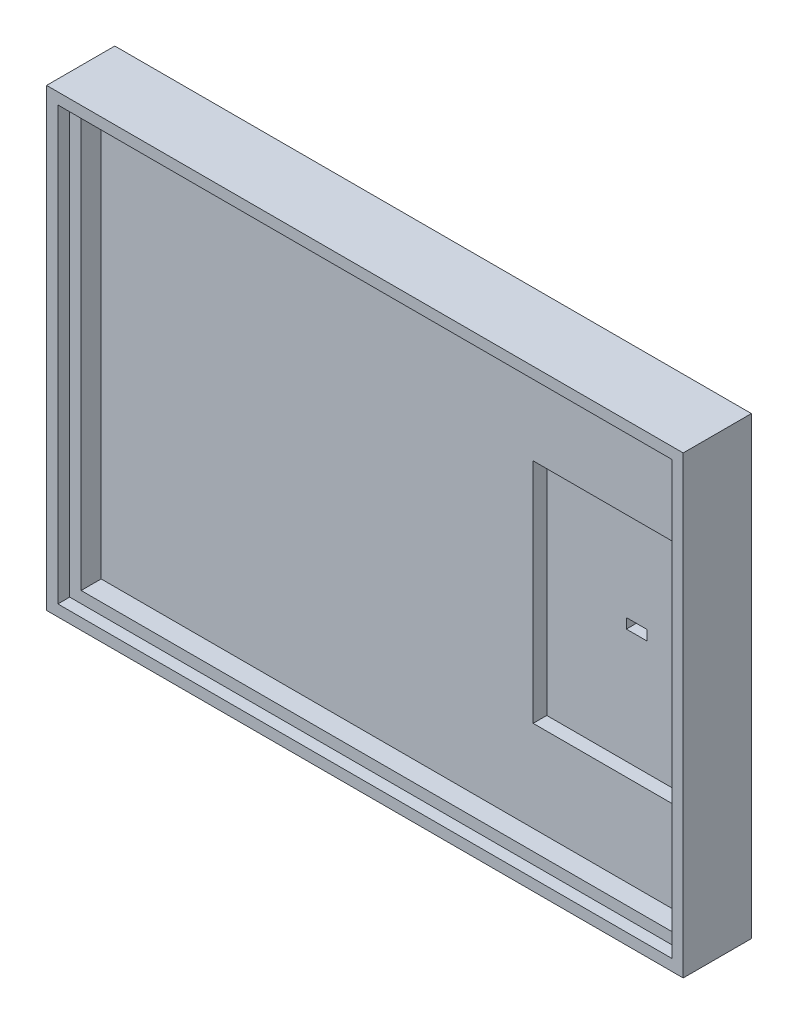
from build123d import *

# Parameters (mm, degrees)
ESQUISSE1_W             = 140
ESQUISSE1_H             = 100
ESQUISSE1_W_2           = 130
ESQUISSE1_H_2           = 90
BOSS_EXTRU_1_DEPTH      = 15
ESQUISSE2_W             = 135.04
ESQUISSE2_H             = 95.04
ESQUISSE2_W_2           = 130
ESQUISSE2_H_2           = 90
ENL_V_MAT_EXTRU_1_DEPTH = 2.6
ESQUISSE3_W             = 8
ESQUISSE3_H             = 100
BOSS_EXTRU_2_DEPTH      = 140
ENL_V_MAT_EXTRU_2_DEPTH = 4
ESQUISSE6_W             = 4.5
ESQUISSE6_H             = 2.2
ENL_V_MAT_EXTRU_3_DEPTH = 10
ESQUISSE7_W             = 35
ESQUISSE7_H             = 50
ENL_V_MAT_EXTRU_4_DEPTH = 3


with BuildPart() as part:
    # Esquisse1 → Boss.-Extru.1 (new body)
    with BuildSketch(Plane.XY):
        with Locations((-22.420857987, -25.830717213)):
            Rectangle(ESQUISSE1_W, ESQUISSE1_H)
        with Locations((-22.420857987, -25.830717213)):
            Rectangle(ESQUISSE1_W_2, ESQUISSE1_H_2, mode=Mode.SUBTRACT)
    extrude(amount=BOSS_EXTRU_1_DEPTH)

    # Esquisse2 → Enlèv. mat.-Extru.1 (cut)
    with BuildSketch(Plane.XY.offset(15)):
        with Locations((-22.420857987, -25.830717213)):
            Rectangle(ESQUISSE2_W, ESQUISSE2_H)
        with Locations((-22.420857987, -25.830717213)):
            Rectangle(ESQUISSE2_W_2, ESQUISSE2_H_2, mode=Mode.SUBTRACT)
    extrude(amount=-ENL_V_MAT_EXTRU_1_DEPTH, mode=Mode.SUBTRACT)

    # Esquisse3 → Boss.-Extru.2 (add)
    with BuildSketch(Plane(origin=(47.579142013, 0, 0), x_dir=(0, 0, -1), z_dir=(1, 0, 0))):
        with Locations((-4, -25.830717213)):
            Rectangle(ESQUISSE3_W, ESQUISSE3_H)
    extrude(amount=-BOSS_EXTRU_2_DEPTH)

    # Esquisse5 → Enlèv. mat.-Extru.2 (cut)
    # profile 1 of 15: a face of its own
    with BuildSketch(Plane(origin=(0, 0, 0), x_dir=(-1, 0, 0), z_dir=(0, 0, -1))):
        with BuildLine():
            add(Edge.make_bspline(
                [(4.002262109, 12.675955398), (4.075167049, 12.674286317), (4.227601487, 12.670796495), (4.464008215, 12.650407394), (4.717447693, 12.619699056), (4.986308134, 12.572508419), (5.271938665, 12.516014365), (5.573282742, 12.441858439), (5.891584737, 12.359020074), (6.108402564, 12.295386309), (6.219544186, 12.262767405)],
                knots=[0, 0, 0, 0, 0.773334932, 1.61693947, 2.515573817, 3.480445069, 4.511531103, 5.603376372, 6.771481835, 8, 8, 8, 8], degree=3))
            add(Edge.make_bspline(
                [(6.219544186, 12.262767405), (6.268861345, 12.248843522), (6.355489682, 12.224385447), (6.445167653, 12.21763132), (6.483792321, 12.21472229)],
                knots=[0, 0, 0, 0, 1.138591857, 2, 2, 2, 2], degree=3))
            add(Edge.make_bspline(
                [(6.483792321, 12.21472229), (6.504689545, 12.217534895), (6.560076614, 12.224989568), (6.662345398, 12.254827778), (6.805383873, 12.300404253), (6.914666372, 12.337788807), (6.976254754, 12.358857636)],
                knots=[0, 0, 0, 0, 0.491859576, 1.303649695, 2.48041676, 4, 4, 4, 4], degree=3))
            add(Edge.make_bspline(
                [(6.976254754, 12.358857636), (7.021498951, 12.37387172), (7.111993798, 12.40390203), (7.207273283, 12.407503929), (7.254916424, 12.409305007)],
                knots=[0, 0, 0, 0, 0.999928683, 2, 2, 2, 2], degree=3))
            add(Edge.make_bspline(
                [(7.254916424, 12.409305007), (7.30158045, 12.40605849), (7.396394559, 12.399462066), (7.539237962, 12.359296992), (7.68161862, 12.288857482), (7.828964555, 12.196492348), (7.971859075, 12.06950632), (8.122613157, 11.923359243), (8.272696159, 11.747365041), (8.420208328, 11.5488456), (8.561495439, 11.340242614), (8.687767762, 11.129384936), (8.789857883, 10.919231358), (8.878754807, 10.714238453), (8.945855727, 10.509913333), (8.993893076, 10.308242175), (9.02463807, 10.108887164), (9.028340787, 9.976727866), (9.030183439, 9.910959005)],
                knots=[0, 0, 0, 0, 0.684457719, 1.390712585, 2.157308825, 3.007185041, 3.93153842, 4.952505252, 6.084389297, 7.316916367, 8.576863306, 9.776704447, 10.915869125, 11.999427841, 13.049928463, 14.063513329, 15.036310526, 16, 16, 16, 16], degree=3))
            add(Edge.make_bspline(
                [(9.030183439, 9.910959005), (9.027457675, 9.837709005), (9.022167498, 9.69554504), (8.966379086, 9.49224738), (8.879432231, 9.305569784), (8.756918704, 9.142418031), (8.613011059, 9.004282924), (8.447287933, 8.906783536), (8.267790543, 8.841724298), (8.14112284, 8.83551473), (8.076487897, 8.832346163)],
                knots=[0, 0, 0, 0, 1.096137936, 2.127389986, 3.137372452, 4.167854936, 5.17052742, 6.107691631, 7.034408616, 8, 8, 8, 8], degree=3))
            add(Edge.make_bspline(
                [(8.076487897, 8.832346163), (8.023479905, 8.833071064), (7.922319164, 8.834454467), (7.778995523, 8.862865731), (7.649652721, 8.902349033), (7.550217428, 8.953247806), (7.469599308, 9.008846536), (7.395097599, 9.067642559), (7.304888543, 9.141650974), (7.197695378, 9.230465119), (7.079214211, 9.339747615), (6.942048033, 9.46198431), (6.787057444, 9.598265339), (6.681280334, 9.697631922), (6.625525412, 9.750007868)],
                knots=[0, 0, 0, 0, 1.077980461, 2.057223784, 2.965377725, 3.82643366, 4.319711792, 4.959381373, 5.759540393, 6.697543975, 7.795103434, 9.043052033, 10.441398099, 12, 12, 12, 12], degree=3))
            add(Edge.make_bspline(
                [(6.625525412, 9.750007868), (6.543922286, 9.823081473), (6.384876287, 9.96550328), (6.138311635, 10.156555277), (5.889558419, 10.313623157), (5.646487206, 10.450110353), (5.400615581, 10.550124598), (5.156265015, 10.623458573), (4.912788739, 10.668643448), (4.750345068, 10.674423126), (4.670089214, 10.677278596)],
                knots=[0, 0, 0, 0, 1.18634838, 2.312214905, 3.373239167, 4.370712315, 5.327458093, 6.241293552, 7.131105035, 8, 8, 8, 8], degree=3))
            add(Edge.make_bspline(
                [(4.670089214, 10.677278596), (4.596298295, 10.674263359), (4.45563894, 10.668515752), (4.254030869, 10.631977326), (4.077895149, 10.560575198), (3.923748636, 10.468671883), (3.803100032, 10.34951185), (3.712670999, 10.213670258), (3.65740383, 10.058338401), (3.65193639, 9.948242131), (3.649130511, 9.891740959)],
                knots=[0, 0, 0, 0, 1.22680445, 2.338519772, 3.383741579, 4.369685134, 5.301239555, 6.175937312, 7.06389491, 8, 8, 8, 8], degree=3))
            add(Edge.make_bspline(
                [(3.649130511, 9.891740959), (3.652575432, 9.835117171), (3.659471167, 9.721772721), (3.724104219, 9.559802706), (3.825150739, 9.410297167), (3.967611128, 9.274368672), (4.146363426, 9.147577483), (4.365028863, 9.033223271), (4.62208482, 8.929947957), (4.808890359, 8.874009427), (4.907912535, 8.844357442)],
                knots=[0, 0, 0, 0, 0.771184117, 1.543687626, 2.348175458, 3.222801976, 4.219098112, 5.33555604, 6.587627318, 8, 8, 8, 8], degree=3))
            add(Edge.make_bspline(
                [(4.907912535, 8.844357442), (5.043341224, 8.805464972), (5.301734214, 8.731259558), (5.66883034, 8.62001591), (5.99915927, 8.519648351), (6.290537255, 8.426371217), (6.544574522, 8.342023138), (6.759840932, 8.26673986), (6.936433651, 8.196580491), (7.040414671, 8.151140062), (7.08675852, 8.130887478)],
                knots=[0, 0, 0, 0, 1.473999505, 2.812337199, 4.012690354, 5.085619275, 6.012771145, 6.812928632, 7.470927909, 8, 8, 8, 8], degree=3))
            add(Edge.make_bspline(
                [(7.08675852, 8.130887478), (7.172228892, 8.089569387), (7.340086509, 8.00842365), (7.576722157, 7.87009874), (7.798967548, 7.728931019), (8.004529507, 7.580027239), (8.19192335, 7.420462669), (8.364497044, 7.255334008), (8.522814712, 7.084236739), (8.661757196, 6.903605689), (8.785159673, 6.71592415), (8.890494753, 6.519992454), (8.982846065, 6.319393966), (9.055012083, 6.109020518), (9.112674832, 5.892324962), (9.15247095, 5.667247207), (9.181263615, 5.43629923), (9.18303246, 5.279502375), (9.183927808, 5.200135437)],
                knots=[0, 0, 0, 0, 1.190175304, 2.337418046, 3.435015623, 4.491600174, 5.517725277, 6.519228743, 7.485938742, 8.438089578, 9.374001488, 10.299728363, 11.225618644, 12.140330766, 13.085464763, 14.034910694, 15.005317296, 16, 16, 16, 16], degree=3))
            add(Edge.make_bspline(
                [(9.183927808, 5.200135437), (9.180148011, 5.060515111), (9.172716144, 4.785992549), (9.103008598, 4.385330836), (8.992358358, 4.00358842), (8.835886976, 3.641425695), (8.631400929, 3.300425483), (8.384088557, 2.979624881), (8.094634024, 2.675776804), (7.872889189, 2.497541089), (7.759390136, 2.406311975)],
                knots=[0, 0, 0, 0, 1.027652808, 2.020578873, 2.985519544, 3.9497389, 4.917775107, 5.90636473, 6.928382616, 8, 8, 8, 8], degree=3))
            add(Edge.make_bspline(
                [(7.759390136, 2.406311975), (7.634469006, 2.317362389), (7.383322206, 2.138534325), (6.974597313, 1.913567018), (6.538754371, 1.722568585), (6.074848244, 1.566866323), (5.582738364, 1.447509562), (5.064068552, 1.361772664), (4.517510319, 1.307280555), (4.143327185, 1.301718702), (3.951814738, 1.298872064)],
                knots=[0, 0, 0, 0, 0.911251608, 1.832019331, 2.767976302, 3.737636716, 4.737705264, 5.77565062, 6.861545178, 8, 8, 8, 8], degree=3))
            add(Edge.make_bspline(
                [(3.951814738, 1.298872064), (3.774759642, 1.301608856), (3.414475736, 1.307177869), (2.86752207, 1.354771636), (2.306643358, 1.432723792), (1.83540154, 1.519036896), (1.464619179, 1.601132675), (1.204404058, 1.666407899), (0.963385523, 1.732355069), (0.74388566, 1.805414882), (0.54227762, 1.875901346), (0.363733028, 1.953665125), (0.202299445, 2.028868729), (0.106145307, 2.087567044), (0.060160388, 2.115639027)],
                knots=[0, 0, 0, 0, 1.588377764, 3.232140496, 4.921862013, 6.667833788, 7.528935282, 8.328750665, 9.074841091, 9.770077056, 10.40415461, 10.989995517, 11.516973737, 12, 12, 12, 12], degree=3))
            add(Edge.make_bspline(
                [(0.060160388, 2.115639027), (0.027669821, 2.139879366), (-0.04024289, 2.190547214), (-0.137475244, 2.282172808), (-0.227071267, 2.396604069), (-0.316342985, 2.52772992), (-0.405905357, 2.675887686), (-0.487670077, 2.845535186), (-0.574191122, 3.030544072), (-0.675988967, 3.303512076), (-0.790409028, 3.65376185), (-0.888212222, 4.077340487), (-0.952490629, 4.495105033), (-0.959655509, 4.772307446), (-0.96320057, 4.909462489)],
                knots=[0, 0, 0, 0, 0.47725386, 0.997569625, 1.567562592, 2.184896417, 2.865804552, 3.603874814, 4.401537228, 5.270238753, 7.032874617, 8.737122659, 10.385583738, 12, 12, 12, 12], degree=3))
            add(Edge.make_bspline(
                [(-0.96320057, 4.909462489), (-0.961910139, 4.971315084), (-0.95949389, 5.087130083), (-0.927425175, 5.249043574), (-0.877501304, 5.388688659), (-0.823165566, 5.464521015), (-0.797444922, 5.500417409)],
                knots=[0, 0, 0, 0, 1.184443567, 2.217794261, 3.156365926, 4, 4, 4, 4], degree=3))
            add(Edge.make_bspline(
                [(-0.797444922, 5.500417409), (-0.762301159, 5.539941618), (-0.69469591, 5.615973431), (-0.567076307, 5.697327336), (-0.426422268, 5.748098718), (-0.327041999, 5.754289073), (-0.27615542, 5.757458776)],
                knots=[0, 0, 0, 0, 1.050954595, 2.021697176, 2.987031679, 4, 4, 4, 4], degree=3))
            add(Edge.make_bspline(
                [(-0.27615542, 5.757458776), (-0.223612798, 5.753596286), (-0.11623173, 5.745702537), (0.041161656, 5.683854891), (0.191635271, 5.582124387), (0.281733682, 5.494004505), (0.329213035, 5.447567782)],
                knots=[0, 0, 0, 0, 0.900274855, 1.839886768, 2.86168051, 4, 4, 4, 4], degree=3))
            add(Edge.make_bspline(
                [(0.329213035, 5.447567782), (0.346131522, 5.429244572), (0.386559573, 5.385459829), (0.453391443, 5.307000513), (0.53179157, 5.201720926), (0.629169073, 5.075150667), (0.737516321, 4.921409417), (0.864255615, 4.74573303), (1.001778481, 4.544269728), (1.099477406, 4.402544394), (1.150784509, 4.328116592)],
                knots=[0, 0, 0, 0, 0.430740811, 1.029288892, 1.778934584, 2.69726761, 3.787316251, 5.026880487, 6.438650696, 8, 8, 8, 8], degree=3))
            add(Edge.make_bspline(
                [(1.150784509, 4.328116592), (1.206755355, 4.25454518), (1.322008056, 4.103050168), (1.550651496, 3.912816832), (1.816876875, 3.735045487), (2.124818391, 3.584272169), (2.456740963, 3.457663905), (2.800652775, 3.367064501), (3.149898034, 3.30887519), (3.384656161, 3.301336247), (3.502592909, 3.297548866)],
                knots=[0, 0, 0, 0, 0.8332964, 1.715887239, 2.671600917, 3.723780634, 4.807464992, 5.87859998, 6.934260452, 8, 8, 8, 8], degree=3))
            add(Edge.make_bspline(
                [(3.502592909, 3.297548866), (3.600396494, 3.300543605), (3.787204037, 3.30626364), (4.053096751, 3.342837618), (4.2894393, 3.410096637), (4.493425667, 3.503167213), (4.664056931, 3.614405811), (4.785191164, 3.750235941), (4.866148071, 3.900546047), (4.874758948, 4.009250243), (4.879085466, 4.063868457)],
                knots=[0, 0, 0, 0, 1.355034506, 2.588153232, 3.708150479, 4.745608851, 5.687179247, 6.504336872, 7.248506944, 8, 8, 8, 8], degree=3))
            add(Edge.make_bspline(
                [(4.879085466, 4.063868457), (4.875248994, 4.114817387), (4.867587006, 4.216569758), (4.809006491, 4.362608534), (4.711817581, 4.495309566), (4.57337235, 4.613819327), (4.39676331, 4.728032339), (4.173251779, 4.834230965), (3.903857668, 4.936727227), (3.706434079, 4.995702685), (3.601085395, 5.027173022)],
                knots=[0, 0, 0, 0, 0.712810623, 1.423585779, 2.171246847, 2.998045855, 3.963141611, 5.112689572, 6.459280596, 8, 8, 8, 8], degree=3))
            add(Edge.make_bspline(
                [(3.601085395, 5.027173022), (3.414957087, 5.082077523), (3.064393971, 5.185487333), (2.576905755, 5.34802461), (2.160199756, 5.504995892), (1.80507907, 5.662061824), (1.492287096, 5.829225063), (1.197915004, 6.009423714), (0.914787974, 6.211410997), (0.73441298, 6.358626314), (0.643908541, 6.432492648)],
                knots=[0, 0, 0, 0, 1.4100512, 2.655759074, 3.733164465, 4.644773426, 5.475138884, 6.308434908, 7.151245159, 8, 8, 8, 8], degree=3))
            add(Edge.make_bspline(
                [(0.643908541, 6.432492648), (0.540253788, 6.525804419), (0.337876492, 6.707987902), (0.074533888, 7.007660735), (-0.151936347, 7.313526084), (-0.33580878, 7.630032552), (-0.480013059, 7.956887378), (-0.579217585, 8.294589526), (-0.64626327, 8.640722119), (-0.652548897, 8.875271677), (-0.655711832, 8.9932973)],
                knots=[0, 0, 0, 0, 1.127646448, 2.201636043, 3.221533347, 4.202810364, 5.157392316, 6.104424208, 7.046143958, 8, 8, 8, 8], degree=3))
            add(Edge.make_bspline(
                [(-0.655711832, 8.9932973), (-0.651404584, 9.111278874), (-0.642817781, 9.346483501), (-0.577667536, 9.696666601), (-0.471082388, 10.041212009), (-0.324161734, 10.379318929), (-0.1408448, 10.705181189), (0.082078945, 11.009503054), (0.340337698, 11.290542012), (0.535556075, 11.455998727), (0.634299518, 11.539688418)],
                knots=[0, 0, 0, 0, 0.959069708, 1.911973412, 2.886287422, 3.886736069, 4.904478038, 5.920447572, 6.948141217, 8, 8, 8, 8], degree=3))
            add(Edge.make_bspline(
                [(0.634299518, 11.539688418), (0.750268606, 11.631019556), (0.981558992, 11.813171667), (1.358519837, 12.041892182), (1.752922328, 12.238353853), (2.165795245, 12.399804928), (2.599084274, 12.521829346), (3.049761192, 12.609970999), (3.519499627, 12.668032977), (3.839533658, 12.673284927), (4.002262109, 12.675955398)],
                knots=[0, 0, 0, 0, 0.975770284, 1.94609002, 2.910288353, 3.888112696, 4.874067793, 5.883869659, 6.924006262, 8, 8, 8, 8], degree=3))
        make_face()
    # profile 2 of 15: a face of its own
    with BuildSketch(Plane(origin=(0, 0, 0), x_dir=(-1, 0, 0), z_dir=(0, 0, -1))):
        with BuildLine():
            add(Edge.make_bspline(
                [(13.673743845, 9.447323641), (13.70839785, 9.445706662), (13.77426471, 9.442633271), (13.867322555, 9.412922007), (13.94501803, 9.361898366), (14.0082528, 9.29037839), (14.055062627, 9.199338928), (14.092236093, 9.089537801), (14.108740231, 8.959341109), (14.111761387, 8.866798181), (14.113356651, 8.817932629)],
                knots=[0, 0, 0, 0, 0.951614334, 1.808733135, 2.652146288, 3.479282537, 4.40608136, 5.451313647, 6.654214102, 8, 8, 8, 8], degree=3))
            add(Edge.make_bspline(
                [(14.113356651, 8.817932629), (14.113356651, 8.80592135), (14.113356651, 8.761879994), (14.113356651, 8.717838638), (14.113356651, 8.685808561)],
                knots=[0, 0, 0, 0, 0.545454545, 2, 2, 2, 2], degree=3))
            add(Edge.make_bspline(
                [(14.113356651, 8.685808561), (14.110562204, 8.648991915), (14.105463396, 8.581815485), (14.10428169, 8.514459851), (14.103747628, 8.484019077)],
                knots=[0, 0, 0, 0, 1.096117968, 2, 2, 2, 2], degree=3))
            add(Edge.make_bspline(
                [(14.103747628, 8.484019077), (14.105912343, 8.422624975), (14.109720403, 8.314623531), (14.158086087, 8.175252108), (14.24885355, 8.078233041), (14.329105329, 8.070173515), (14.370398019, 8.066026572)],
                knots=[0, 0, 0, 0, 1.316672881, 2.31622535, 3.133631872, 4, 4, 4, 4], degree=3))
            add(Edge.make_bspline(
                [(14.370398019, 8.066026572), (14.398255564, 8.071680088), (14.46523798, 8.085273753), (14.565449664, 8.157781288), (14.688477747, 8.259703072), (14.769573905, 8.349721302), (14.814815336, 8.399940125)],
                knots=[0, 0, 0, 0, 0.59751608, 1.436704843, 2.570004488, 4, 4, 4, 4], degree=3))
            add(Edge.make_bspline(
                [(14.814815336, 8.399940125), (14.893213128, 8.47787826), (15.05152694, 8.635263858), (15.323627622, 8.839983777), (15.625481639, 9.016706803), (15.950974413, 9.16989998), (16.292641341, 9.293631088), (16.643311602, 9.383092748), (16.99830577, 9.438192877), (17.23689576, 9.444276463), (17.356401942, 9.447323641)],
                knots=[0, 0, 0, 0, 0.939384979, 1.896961811, 2.886272719, 3.909939519, 4.952641222, 5.971812359, 6.984110933, 8, 8, 8, 8], degree=3))
            add(Edge.make_bspline(
                [(17.356401942, 9.447323641), (17.468716899, 9.445152948), (17.684749743, 9.440977716), (17.994991348, 9.392478343), (18.280168683, 9.32379586), (18.53870027, 9.218643402), (18.770902267, 9.084532429), (18.97499037, 8.918437351), (19.153903654, 8.724978657), (19.247606546, 8.576147056), (19.29502235, 8.500834867)],
                knots=[0, 0, 0, 0, 1.187366183, 2.283846248, 3.315516403, 4.284786976, 5.226517843, 6.142273449, 7.059947935, 8, 8, 8, 8], degree=3))
            add(Edge.make_bspline(
                [(19.29502235, 8.500834867), (19.327510605, 8.448599319), (19.384723699, 8.356610463), (19.474742484, 8.246754847), (19.553696395, 8.168562153), (19.613635355, 8.155523965), (19.638544925, 8.150105524)],
                knots=[0, 0, 0, 0, 1.456893054, 2.565645992, 3.403907897, 4, 4, 4, 4], degree=3))
            add(Edge.make_bspline(
                [(19.638544925, 8.150105524), (19.658141621, 8.15568507), (19.711901054, 8.170991385), (19.798733056, 8.236225732), (19.914983589, 8.334231674), (20.000857204, 8.414619595), (20.049330662, 8.459996519)],
                knots=[0, 0, 0, 0, 0.468273314, 1.284609833, 2.467231747, 4, 4, 4, 4], degree=3))
            add(Edge.make_bspline(
                [(20.049330662, 8.459996519), (20.135442261, 8.538228847), (20.304554096, 8.691866833), (20.573962275, 8.895266212), (20.855100674, 9.063885415), (21.143347616, 9.204002265), (21.440975889, 9.313609777), (21.747259986, 9.388976282), (22.061476098, 9.440644485), (22.274410114, 9.44508275), (22.381921016, 9.447323641)],
                knots=[0, 0, 0, 0, 1.074299632, 2.109782961, 3.111866896, 4.097659278, 5.06637819, 6.035068866, 7.007901492, 8, 8, 8, 8], degree=3))
            add(Edge.make_bspline(
                [(22.381921016, 9.447323641), (22.465263951, 9.445359889), (22.627576365, 9.441535434), (22.865599497, 9.41512889), (23.091953522, 9.368895453), (23.307647512, 9.307320767), (23.51173357, 9.227942692), (23.702804364, 9.128058043), (23.883581272, 9.011145834), (23.993906657, 8.919181162), (24.049086521, 8.873184512)],
                knots=[0, 0, 0, 0, 1.109028893, 2.159861016, 3.181768615, 4.180012923, 5.141700663, 6.090132129, 7.0447688, 8, 8, 8, 8], degree=3))
            add(Edge.make_bspline(
                [(24.049086521, 8.873184512), (24.103245498, 8.821582524), (24.211959861, 8.718000853), (24.351952699, 8.539159948), (24.466506209, 8.339731702), (24.564029317, 8.124635521), (24.63828787, 7.889897583), (24.689563639, 7.636164204), (24.725153065, 7.364767332), (24.727645595, 7.177313699), (24.728924905, 7.081101706)],
                knots=[0, 0, 0, 0, 0.907302166, 1.821245241, 2.744855588, 3.693348952, 4.683228593, 5.726054494, 6.832880296, 8, 8, 8, 8], degree=3))
            add(Edge.make_bspline(
                [(24.728924905, 7.081101706), (24.729227485, 7.030650484), (24.729924018, 6.914513064), (24.722973249, 6.718381753), (24.719630961, 6.478111879), (24.714750812, 6.303566752), (24.712109114, 6.209082861)],
                knots=[0, 0, 0, 0, 0.694057109, 1.59770169, 2.699599955, 4, 4, 4, 4], degree=3))
            add(Edge.make_bspline(
                [(24.712109114, 6.209082861), (24.710282261, 6.187473919), (24.705822965, 6.134727111), (24.705072038, 6.042509434), (24.70207496, 5.923227801), (24.699958829, 5.778278017), (24.697614023, 5.606119492), (24.694548423, 5.408339759), (24.695517753, 5.183318442), (24.695371096, 5.024770348), (24.695293324, 4.940691814)],
                knots=[0, 0, 0, 0, 0.410119854, 1.001090803, 1.743503359, 2.667662983, 3.743286347, 5.000671759, 6.409447145, 8, 8, 8, 8], degree=3))
            add(Edge.make_bspline(
                [(24.695293324, 4.940691814), (24.695559236, 4.835792148), (24.696048443, 4.642805153), (24.693030321, 4.379362794), (24.690862327, 4.166359946), (24.688929216, 4.041446891), (24.688086557, 3.986996273)],
                knots=[0, 0, 0, 0, 1.319840801, 2.428149863, 3.31481772, 4, 4, 4, 4], degree=3))
            add(Edge.make_bspline(
                [(24.688086557, 3.986996273), (24.686370265, 3.938153722), (24.68352879, 3.857290468), (24.681631206, 3.776399942), (24.680879789, 3.74436844)],
                knots=[0, 0, 0, 0, 1.20802833, 2, 2, 2, 2], degree=3))
            add(Edge.make_bspline(
                [(24.680879789, 3.74436844), (24.684712579, 3.660574349), (24.692242268, 3.495957055), (24.761802781, 3.259119482), (24.865979802, 3.034585278), (24.970929261, 2.906421413), (25.024402365, 2.84112027)],
                knots=[0, 0, 0, 0, 1.015564129, 1.995121824, 2.978488697, 4, 4, 4, 4], degree=3))
            add(Edge.make_bspline(
                [(25.024402365, 2.84112027), (25.055462282, 2.804952974), (25.111301938, 2.739931251), (25.18832897, 2.654535325), (25.239513248, 2.584473432), (25.288188585, 2.520019527), (25.322816993, 2.433642384), (25.325567478, 2.361872225), (25.327086592, 2.322233023)],
                knots=[0, 0, 0, 0, 1.389966446, 2.498887758, 3.348543292, 3.918390048, 4.850311072, 6, 6, 6, 6], degree=3))
            add(Edge.make_bspline(
                [(25.327086592, 2.322233023), (25.325349321, 2.280407961), (25.321931595, 2.19812568), (25.291766329, 2.079857443), (25.245760253, 1.969137433), (25.179540547, 1.866290564), (25.092339008, 1.773300027), (24.987161072, 1.68920223), (24.865923788, 1.610253547), (24.722709595, 1.54604232), (24.563619009, 1.481251767), (24.383752312, 1.430253653), (24.186174944, 1.387599722), (23.970536992, 1.351539682), (23.735767167, 1.322558668), (23.481571254, 1.304686383), (23.209219482, 1.292237997), (23.021737329, 1.290276769), (22.92483082, 1.289263041)],
                knots=[0, 0, 0, 0, 0.697105557, 1.37141305, 2.024317024, 2.691700165, 3.401126843, 4.142208432, 4.935681229, 5.808599554, 6.756765621, 7.801483807, 8.923623799, 10.130009817, 11.449699595, 12.870566224, 14.382446028, 16, 16, 16, 16], degree=3))
            add(Edge.make_bspline(
                [(22.92483082, 1.289263041), (22.756538366, 1.29230276), (22.436021575, 1.298091972), (21.980464735, 1.346219531), (21.574729818, 1.422083713), (21.272842536, 1.518168259), (21.06245891, 1.60894345), (20.929459065, 1.680767531), (20.816302512, 1.757755668), (20.725576206, 1.842320457), (20.650674388, 1.928569697), (20.599189192, 2.022738611), (20.566119212, 2.121442145), (20.56270285, 2.189860988), (20.561011141, 2.223740536)],
                knots=[0, 0, 0, 0, 2.210889964, 4.210690016, 6.012200637, 7.626081637, 8.361131166, 9.02034532, 9.609964384, 10.153566301, 10.646652515, 11.103490671, 11.556067752, 12, 12, 12, 12], degree=3))
            add(Edge.make_bspline(
                [(20.561011141, 2.223740536), (20.562665556, 2.271238684), (20.5655835, 2.355012663), (20.597361455, 2.459144388), (20.650934252, 2.541813736), (20.715155389, 2.637484675), (20.809674824, 2.766145949), (20.881311146, 2.86355142), (20.921349507, 2.917992454)],
                knots=[0, 0, 0, 0, 1.067315163, 1.882457368, 2.407985763, 3.277890044, 4.478581549, 6, 6, 6, 6], degree=3))
            add(Edge.make_bspline(
                [(20.921349507, 2.917992454), (20.942940017, 2.952510982), (20.993673273, 3.03362242), (21.036259261, 3.193886254), (21.084276892, 3.396430691), (21.117176076, 3.648434931), (21.142874098, 3.948152453), (21.161204368, 4.295113393), (21.173140605, 4.690772453), (21.175002071, 4.970308751), (21.175988619, 5.118458741)],
                knots=[0, 0, 0, 0, 0.435371455, 1.023033347, 1.763949906, 2.676446859, 3.747420984, 4.996768205, 6.408332797, 8, 8, 8, 8], degree=3))
            add(Edge.make_bspline(
                [(21.175988619, 5.118458741), (21.17557345, 5.205746405), (21.174777238, 5.373147153), (21.167500491, 5.614236823), (21.15592684, 5.834546992), (21.139226123, 6.034843465), (21.118222446, 6.214444428), (21.092068335, 6.373214202), (21.06184877, 6.511568593), (21.034853634, 6.595212295), (21.02224425, 6.634282133)],
                knots=[0, 0, 0, 0, 1.369755752, 2.626924869, 3.784706422, 4.831390232, 5.780604467, 6.621402925, 7.356059531, 8, 8, 8, 8], degree=3))
            add(Edge.make_bspline(
                [(21.02224425, 6.634282133), (21.006408334, 6.673980174), (20.975797301, 6.750717013), (20.914975208, 6.855365359), (20.84391772, 6.945912288), (20.757142794, 7.015910057), (20.661948349, 7.072587669), (20.554940645, 7.113669224), (20.436375356, 7.137829053), (20.35373111, 7.140026571), (20.311176541, 7.1411581)],
                knots=[0, 0, 0, 0, 1.088860078, 2.104780958, 3.077701305, 4.006080068, 4.930856959, 5.894297786, 6.915747249, 8, 8, 8, 8], degree=3))
            add(Edge.make_bspline(
                [(20.311176541, 7.1411581), (20.267745488, 7.139549839), (20.182100265, 7.136378378), (20.057424408, 7.10383429), (19.941189267, 7.049753432), (19.833420464, 6.978551778), (19.740254644, 6.890325639), (19.66552388, 6.789293566), (19.602224542, 6.680887144), (19.578494108, 6.600512916), (19.566477252, 6.559812204)],
                knots=[0, 0, 0, 0, 1.023804115, 2.018922551, 3.017268988, 4.039850232, 5.056295057, 6.028149656, 7.001474535, 8, 8, 8, 8], degree=3))
            add(Edge.make_bspline(
                [(19.566477252, 6.559812204), (19.560634355, 6.531030437), (19.546905577, 6.463403291), (19.530043801, 6.345668954), (19.520429889, 6.197089547), (19.507181896, 6.018650614), (19.49842704, 5.810360795), (19.491216302, 5.57172467), (19.486539734, 5.302647994), (19.485401077, 5.112855163), (19.484800556, 5.012759487)],
                knots=[0, 0, 0, 0, 0.454380531, 1.06763626, 1.838287599, 2.757211176, 3.836248245, 5.063385316, 6.451245853, 8, 8, 8, 8], degree=3))
            add(Edge.make_bspline(
                [(19.484800556, 5.012759487), (19.486904093, 4.905450699), (19.49089197, 4.702015203), (19.501109967, 4.413777244), (19.510684367, 4.159138031), (19.519614714, 3.937245888), (19.531068239, 3.748183313), (19.545536946, 3.592019309), (19.559850015, 3.46952791), (19.57741521, 3.343597176), (19.63170452, 3.197382797), (19.721208593, 3.00865958), (19.852972714, 2.794302043), (19.957201373, 2.645139531), (20.013296826, 2.564860856)],
                knots=[0, 0, 0, 0, 1.504995723, 2.853163807, 4.044231697, 5.078229417, 5.967055622, 6.700010808, 7.276613572, 7.697495053, 8.478662858, 9.448027591, 10.626538531, 12, 12, 12, 12], degree=3))
            add(Edge.make_bspline(
                [(20.013296826, 2.564860856), (20.038493514, 2.520262805), (20.092281301, 2.425058607), (20.097176155, 2.31557078), (20.099778033, 2.257372117)],
                knots=[0, 0, 0, 0, 0.936892525, 2, 2, 2, 2], degree=3))
            add(Edge.make_bspline(
                [(20.099778033, 2.257372117), (20.097941514, 2.218759196), (20.094292379, 2.142035929), (20.064817472, 2.031132955), (20.015873302, 1.927152756), (19.944992533, 1.833972642), (19.855703579, 1.747600827), (19.747357256, 1.670013773), (19.621264032, 1.595972451), (19.472899052, 1.536115924), (19.307761203, 1.477039586), (19.12160043, 1.430596684), (18.91718304, 1.389775278), (18.693457407, 1.356564206), (18.450622189, 1.330650457), (18.18788125, 1.310755208), (17.905762446, 1.302855918), (17.711135897, 1.300225082), (17.611041054, 1.298872064)],
                knots=[0, 0, 0, 0, 0.636649692, 1.265012917, 1.879885558, 2.522272179, 3.185928085, 3.923519486, 4.717023142, 5.593488536, 6.559106068, 7.61064193, 8.756397919, 9.999496181, 11.342380085, 12.786986762, 14.347573556, 16, 16, 16, 16], degree=3))
            add(Edge.make_bspline(
                [(17.611041054, 1.298872064), (17.491731897, 1.300244659), (17.262685512, 1.302879728), (16.934105151, 1.310289652), (16.63633656, 1.33135805), (16.369029472, 1.352429756), (16.13303168, 1.387905047), (15.926049246, 1.423517257), (15.749463126, 1.471389152), (15.644144449, 1.511144681), (15.595548462, 1.529488618)],
                knots=[0, 0, 0, 0, 1.404485319, 2.696291668, 3.867449597, 4.917886804, 5.850936666, 6.675415091, 7.388812005, 8, 8, 8, 8], degree=3))
            add(Edge.make_bspline(
                [(15.595548462, 1.529488618), (15.532139884, 1.561855671), (15.41131159, 1.62353275), (15.273710823, 1.773832661), (15.193426603, 1.96113801), (15.184587972, 2.09721187), (15.179958213, 2.168488654)],
                knots=[0, 0, 0, 0, 1.04644726, 1.994058889, 2.949268942, 4, 4, 4, 4], degree=3))
            add(Edge.make_bspline(
                [(15.179958213, 2.168488654), (15.180739397, 2.226164014), (15.182048853, 2.322842066), (15.208611965, 2.440837013), (15.260793857, 2.520264904), (15.321385284, 2.600869778), (15.405571381, 2.709012895), (15.470476784, 2.789203162), (15.506664998, 2.833913502)],
                knots=[0, 0, 0, 0, 1.356948262, 2.274578133, 2.781254468, 3.575388078, 4.648149871, 6, 6, 6, 6], degree=3))
            add(Edge.make_bspline(
                [(15.506664998, 2.833913502), (15.548712373, 2.887352406), (15.625730078, 2.985235847), (15.686666381, 3.130459937), (15.711299316, 3.25771575), (15.727764686, 3.381211243), (15.737998742, 3.536135872), (15.745304734, 3.649082866), (15.749292831, 3.710736859)],
                knots=[0, 0, 0, 0, 1.309795413, 2.399137562, 3.000154868, 3.812217287, 4.805762451, 6, 6, 6, 6], degree=3))
            add(Edge.make_bspline(
                [(15.749292831, 3.710736859), (15.762305728, 4.013375889), (15.788426941, 4.62087309), (15.79276083, 5.228916644), (15.794935691, 5.534048989)],
                knots=[0, 0, 0, 0, 0.996347075, 2, 2, 2, 2], degree=3))
            add(Edge.make_bspline(
                [(15.794935691, 5.534048989), (15.793479428, 5.659913668), (15.790752516, 5.895600433), (15.749370696, 6.223778164), (15.687497368, 6.503080435), (15.598352843, 6.734541691), (15.4772623, 6.915705168), (15.328008581, 7.046950032), (15.150038353, 7.13018292), (15.020713931, 7.137428533), (14.954146171, 7.1411581)],
                knots=[0, 0, 0, 0, 1.492406664, 2.794592597, 3.916912743, 4.880218059, 5.720878374, 6.475232902, 7.215149555, 8, 8, 8, 8], degree=3))
            add(Edge.make_bspline(
                [(14.954146171, 7.1411581), (14.904242157, 7.139949596), (14.807972709, 7.13761828), (14.672721247, 7.10199613), (14.550695471, 7.050407383), (14.449039517, 6.970133606), (14.360304386, 6.87295154), (14.289932084, 6.751774803), (14.238267388, 6.609013731), (14.21618102, 6.505690285), (14.20464237, 6.451710694)],
                knots=[0, 0, 0, 0, 1.059832721, 2.044515103, 2.960770572, 3.86149109, 4.779491658, 5.750784474, 6.824935301, 8, 8, 8, 8], degree=3))
            add(Edge.make_bspline(
                [(14.20464237, 6.451710694), (14.189036735, 6.332520844), (14.154769693, 6.070802324), (14.127045271, 5.64169201), (14.107534692, 5.142667457), (14.105065326, 4.786973786), (14.103747628, 4.597169238)],
                knots=[0, 0, 0, 0, 0.775896733, 1.703723476, 2.774665503, 4, 4, 4, 4], degree=3))
            add(Edge.make_bspline(
                [(14.103747628, 4.597169238), (14.103590387, 4.525101855), (14.103289872, 4.387368196), (14.105316313, 4.191153423), (14.111014191, 4.014222878), (14.114841416, 3.857211815), (14.121856625, 3.718612647), (14.131916157, 3.600178452), (14.140600165, 3.500661019), (14.156245237, 3.39304889), (14.189994425, 3.269997809), (14.253113774, 3.126129706), (14.332869646, 2.976811949), (14.403479544, 2.882682944), (14.440063436, 2.833913502)],
                knots=[0, 0, 0, 0, 1.412097342, 2.698770588, 3.844568214, 4.880581609, 5.776147751, 6.563152666, 7.209495663, 7.733174136, 8.692317828, 9.69770097, 10.807149422, 12, 12, 12, 12], degree=3))
            add(Edge.make_bspline(
                [(14.440063436, 2.833913502), (14.482332034, 2.778786754), (14.560013204, 2.677474897), (14.647458053, 2.52429084), (14.706459507, 2.388052681), (14.714932839, 2.29943534), (14.718725105, 2.259774373)],
                knots=[0, 0, 0, 0, 1.284206768, 2.360113337, 3.266063623, 4, 4, 4, 4], degree=3))
            add(Edge.make_bspline(
                [(14.718725105, 2.259774373), (14.716331468, 2.217114043), (14.711646464, 2.133616108), (14.677106222, 2.013023281), (14.617983357, 1.902711026), (14.534945187, 1.803692711), (14.428748276, 1.715877142), (14.300067272, 1.640044889), (14.149552397, 1.571890697), (14.039346719, 1.53783696), (13.981232584, 1.519879595)],
                knots=[0, 0, 0, 0, 0.905410456, 1.772135923, 2.639528615, 3.545418166, 4.499215068, 5.55218263, 6.709206338, 8, 8, 8, 8], degree=3))
            add(Edge.make_bspline(
                [(13.981232584, 1.519879595), (13.844729605, 1.485836691), (13.566511915, 1.416451112), (13.133467933, 1.348787424), (12.680033108, 1.30725461), (12.371014791, 1.301706146), (12.213172336, 1.298872064)],
                knots=[0, 0, 0, 0, 0.944431816, 1.924922391, 2.940077903, 4, 4, 4, 4], degree=3))
            add(Edge.make_bspline(
                [(12.213172336, 1.298872064), (12.11307169, 1.299141718), (11.919225099, 1.299663906), (11.638821203, 1.309065904), (11.378551981, 1.326267857), (11.139022471, 1.347573758), (10.920030769, 1.373005144), (10.721893649, 1.40638294), (10.544804357, 1.447144893), (10.387017189, 1.492071673), (10.249168184, 1.544451866), (10.130066718, 1.604974456), (10.028022813, 1.671329541), (9.944942113, 1.747124838), (9.878435481, 1.828987046), (9.831751114, 1.919696525), (9.804724741, 2.018014346), (9.800870907, 2.085846312), (9.798905286, 2.120443538)],
                knots=[0, 0, 0, 0, 1.736956559, 3.363645698, 4.867476994, 6.262613987, 7.536282421, 8.692176647, 9.747206389, 10.688190028, 11.537163347, 12.301526088, 13.002924469, 13.642255046, 14.245537542, 14.823484655, 15.399926477, 16, 16, 16, 16], degree=3))
            add(Edge.make_bspline(
                [(9.798905286, 2.120443538), (9.802023512, 2.170478688), (9.807908556, 2.264910288), (9.84916479, 2.379651489), (9.906252574, 2.467024934), (9.968914953, 2.547393529), (10.051559433, 2.644299017), (10.114906767, 2.712465026), (10.149634628, 2.74983455)],
                knots=[0, 0, 0, 0, 1.212849545, 2.28901728, 2.909227069, 3.741234993, 4.761714609, 6, 6, 6, 6], degree=3))
            add(Edge.make_bspline(
                [(10.149634628, 2.74983455), (10.197194286, 2.808151901), (10.294299701, 2.927221943), (10.3925335, 3.146383364), (10.466642749, 3.391734521), (10.485668609, 3.568431286), (10.495559459, 3.660289488)],
                knots=[0, 0, 0, 0, 0.907535494, 1.852969818, 2.883837332, 4, 4, 4, 4], degree=3))
            add(Edge.make_bspline(
                [(10.495559459, 3.660289488), (10.517172189, 3.999696141), (10.561081347, 4.689246267), (10.565422671, 5.380185249), (10.567627132, 5.731033963)],
                knots=[0, 0, 0, 0, 0.984429243, 2, 2, 2, 2], degree=3))
            add(Edge.make_bspline(
                [(10.567627132, 5.731033963), (10.566307232, 5.848740575), (10.563882443, 6.064979341), (10.556666216, 6.360795234), (10.537754291, 6.598862769), (10.513162231, 6.787519978), (10.473104521, 6.940165928), (10.418843178, 7.071918451), (10.342330074, 7.186531772), (10.281069669, 7.252437369), (10.250529371, 7.285293447)],
                knots=[0, 0, 0, 0, 1.733982023, 3.185497606, 4.356979575, 5.251046182, 5.983458394, 6.675738221, 7.339812555, 8, 8, 8, 8], degree=3))
            add(Edge.make_bspline(
                [(10.250529371, 7.285293447), (10.221388251, 7.313808465), (10.167528289, 7.366511239), (10.098142812, 7.443102388), (10.045056362, 7.507803212), (9.991828424, 7.580683648), (9.960047261, 7.691415022), (9.955292129, 7.782429903), (9.952649655, 7.833007763)],
                knots=[0, 0, 0, 0, 1.133747313, 2.095444156, 2.871028748, 3.463983958, 4.590711096, 6, 6, 6, 6], degree=3))
            add(Edge.make_bspline(
                [(9.952649655, 7.833007763), (9.954772284, 7.877332018), (9.959022755, 7.966089389), (9.999384824, 8.094256646), (10.063932225, 8.215341893), (10.153544783, 8.328285265), (10.270019616, 8.432474054), (10.409084892, 8.530691414), (10.57531523, 8.619537396), (10.696100312, 8.670788035), (10.759807594, 8.69781984)],
                knots=[0, 0, 0, 0, 0.842470122, 1.687009351, 2.533200222, 3.445683167, 4.417446727, 5.500962338, 6.68189933, 8, 8, 8, 8], degree=3))
            add(Edge.make_bspline(
                [(10.759807594, 8.69781984), (10.91647294, 8.756262117), (11.219059744, 8.869138782), (11.660028474, 9.019217913), (12.069252488, 9.15111485), (12.449006094, 9.257246285), (12.7984107, 9.339510184), (13.117539566, 9.397593649), (13.405391131, 9.436123313), (13.587965684, 9.443743489), (13.673743845, 9.447323641)],
                knots=[0, 0, 0, 0, 1.328021485, 2.564969149, 3.699417284, 4.742546229, 5.695962852, 6.549255707, 7.318403493, 8, 8, 8, 8], degree=3))
        make_face()
    # profile 3 of 15: a face of its own
    with BuildSketch(Plane(origin=(0, 0, 0), x_dir=(-1, 0, 0), z_dir=(0, 0, -1))):
        with BuildLine():
            add(Edge.make_bspline(
                [(30.407857548, 9.447323641), (30.525625314, 9.444657976), (30.756767535, 9.439426089), (31.097370784, 9.408842244), (31.424024533, 9.353290004), (31.737326912, 9.276709306), (32.036229556, 9.178081066), (32.321782839, 9.057478856), (32.593239645, 8.913840999), (32.763705383, 8.801686417), (32.848549412, 8.745864956)],
                knots=[0, 0, 0, 0, 1.095631755, 2.150391113, 3.17783599, 4.175108083, 5.147961757, 6.10259305, 7.055624589, 8, 8, 8, 8], degree=3))
            add(Edge.make_bspline(
                [(32.848549412, 8.745864956), (32.932098575, 8.683180013), (33.093668102, 8.561958251), (33.29840628, 8.349832737), (33.468267906, 8.128228733), (33.596359337, 7.88422387), (33.692440933, 7.61181315), (33.753024363, 7.299489618), (33.795693668, 6.943746046), (33.798404912, 6.691289027), (33.799842698, 6.557409948)],
                knots=[0, 0, 0, 0, 1.000592875, 1.934972331, 2.818414885, 3.67067903, 4.567250615, 5.579716464, 6.716512891, 8, 8, 8, 8], degree=3))
            Line((33.799842698, 6.557409948), (33.783026907, 5.368293341))
            add(Edge.make_bspline(
                [(33.783026907, 5.368293341), (33.783103373, 5.26978369), (33.783249508, 5.081519971), (33.794774183, 4.81333789), (33.804394526, 4.571989143), (33.824662388, 4.358235215), (33.846470955, 4.170133092), (33.879104166, 4.010407886), (33.909342455, 3.87545026), (33.941426645, 3.798509218), (33.955989323, 3.763586486)],
                knots=[0, 0, 0, 0, 1.457025271, 2.78454945, 3.970563437, 5.029049345, 5.960548276, 6.768987474, 7.441256315, 8, 8, 8, 8], degree=3))
            add(Edge.make_bspline(
                [(33.955989323, 3.763586486), (33.981289337, 3.714033183), (34.023846947, 3.630678679), (34.102625481, 3.546082102), (34.17778268, 3.512299492), (34.250876058, 3.492251719), (34.344681988, 3.470609192), (34.414748904, 3.458143905), (34.453256267, 3.451293236)],
                knots=[0, 0, 0, 0, 1.601216472, 2.693435059, 3.229601988, 3.95159982, 4.8742406, 6, 6, 6, 6], degree=3))
            add(Edge.make_bspline(
                [(34.453256267, 3.451293236), (34.491196601, 3.442096252), (34.562571631, 3.42479448), (34.652408675, 3.353717602), (34.696547579, 3.243764717), (34.702350563, 3.163336961), (34.705493123, 3.119781939)],
                knots=[0, 0, 0, 0, 1.010252561, 1.900531691, 2.863049382, 4, 4, 4, 4], degree=3))
            add(Edge.make_bspline(
                [(34.705493123, 3.119781939), (34.701770512, 3.056060733), (34.694073708, 2.924311943), (34.628217867, 2.727534947), (34.528663197, 2.525922968), (34.389057572, 2.326275311), (34.22295209, 2.130258267), (34.029033644, 1.94963079), (33.812460738, 1.785293546), (33.654308959, 1.692101467), (33.574030655, 1.644796895)],
                knots=[0, 0, 0, 0, 0.7879245, 1.629098162, 2.547710915, 3.568813871, 4.638656405, 5.726795971, 6.846115007, 8, 8, 8, 8], degree=3))
            add(Edge.make_bspline(
                [(33.574030655, 1.644796895), (33.47200605, 1.591433797), (33.270199192, 1.485880443), (32.948376607, 1.379969129), (32.620878937, 1.311035616), (32.399674417, 1.302932646), (32.288823817, 1.298872064)],
                knots=[0, 0, 0, 0, 1.025560559, 2.028580785, 3.012077136, 4, 4, 4, 4], degree=3))
            add(Edge.make_bspline(
                [(32.288823817, 1.298872064), (32.219084354, 1.300888162), (32.082300907, 1.304842435), (31.883261089, 1.330690157), (31.69547382, 1.376641149), (31.519679611, 1.442497445), (31.352496503, 1.523270626), (31.198782569, 1.62565164), (31.054448988, 1.743247831), (30.971240189, 1.835800341), (30.929147051, 1.882620217)],
                knots=[0, 0, 0, 0, 1.094386292, 2.146473792, 3.143067577, 4.121109535, 5.087702514, 6.049628506, 7.013358469, 8, 8, 8, 8], degree=3))
            add(Edge.make_bspline(
                [(30.929147051, 1.882620217), (30.902254615, 1.915059143), (30.853081135, 1.974374518), (30.769077631, 2.039836052), (30.689478054, 2.086917984), (30.633382626, 2.091761754), (30.607244777, 2.094018725)],
                knots=[0, 0, 0, 0, 1.267833877, 2.31826544, 3.216390252, 4, 4, 4, 4], degree=3))
            add(Edge.make_bspline(
                [(30.607244777, 2.094018725), (30.577295673, 2.091426088), (30.51129467, 2.085712506), (30.408931632, 2.04185361), (30.294267463, 1.976914804), (30.216713811, 1.920362425), (30.174838739, 1.889826984)],
                knots=[0, 0, 0, 0, 0.739366353, 1.629394992, 2.719992501, 4, 4, 4, 4], degree=3))
            add(Edge.make_bspline(
                [(30.174838739, 1.889826984), (30.1058762, 1.84229084), (29.969585267, 1.748344972), (29.753688921, 1.627130379), (29.530674303, 1.526881259), (29.300084958, 1.444222056), (29.062913494, 1.380465883), (28.81934382, 1.330557242), (28.56827676, 1.305111622), (28.398818359, 1.300968195), (28.313090516, 1.298872064)],
                knots=[0, 0, 0, 0, 1.011691478, 1.999409812, 2.986748948, 3.963027248, 4.955897739, 5.952109891, 6.963986423, 8, 8, 8, 8], degree=3))
            add(Edge.make_bspline(
                [(28.313090516, 1.298872064), (28.22578499, 1.30046358), (28.0557626, 1.303562963), (27.805964253, 1.321697569), (27.569511263, 1.358458035), (27.345638279, 1.406202974), (27.133611217, 1.465620919), (26.935922363, 1.543089019), (26.748353579, 1.63103981), (26.633269547, 1.702891308), (26.576259593, 1.738484871)],
                knots=[0, 0, 0, 0, 1.153304305, 2.245992472, 3.305043378, 4.311171481, 5.268588108, 6.209444995, 7.113000665, 8, 8, 8, 8], degree=3))
            add(Edge.make_bspline(
                [(26.576259593, 1.738484871), (26.505965946, 1.788766795), (26.366503668, 1.888525907), (26.182329826, 2.069750087), (26.021935344, 2.272442952), (25.882062719, 2.492114117), (25.772147149, 2.727255035), (25.692143415, 2.96984545), (25.645263087, 3.218886747), (25.63815468, 3.386241766), (25.634575331, 3.470511282)],
                knots=[0, 0, 0, 0, 1.010338236, 2.004506511, 3.01153558, 4.030832464, 5.045465139, 6.041310741, 7.01372665, 8, 8, 8, 8], degree=3))
            add(Edge.make_bspline(
                [(25.634575331, 3.470511282), (25.637229473, 3.537885361), (25.642471139, 3.670942454), (25.673917984, 3.867937099), (25.728910554, 4.058712649), (25.810577204, 4.241677246), (25.908755262, 4.42172722), (26.03240379, 4.593982751), (26.176677506, 4.761072342), (26.286924541, 4.862470784), (26.343240783, 4.914267)],
                knots=[0, 0, 0, 0, 0.97412096, 1.923791844, 2.876280749, 3.835429271, 4.814763874, 5.83616163, 6.89467099, 8, 8, 8, 8], degree=3))
            add(Edge.make_bspline(
                [(26.343240783, 4.914267), (26.438902651, 4.994727613), (26.632877231, 5.157878447), (26.967520505, 5.354627131), (27.331798225, 5.525764006), (27.730281589, 5.668729713), (28.164741091, 5.774143335), (28.631829801, 5.853433276), (29.132856798, 5.901717387), (29.478075963, 5.907977564), (29.655951492, 5.911203145)],
                knots=[0, 0, 0, 0, 0.847347363, 1.718175208, 2.625308533, 3.577956686, 4.586647072, 5.656481625, 6.792492964, 8, 8, 8, 8], degree=3))
            add(Edge.make_bspline(
                [(29.655951492, 5.911203145), (29.730506158, 5.911128779), (29.863918984, 5.910995703), (30.04119775, 5.932341852), (30.174907559, 5.953545717), (30.274417597, 5.994055603), (30.336244996, 6.068080267), (30.375278737, 6.164863469), (30.398400084, 6.291316538), (30.399846589, 6.385137115), (30.400650781, 6.437297159)],
                knots=[0, 0, 0, 0, 1.629606954, 2.916121579, 3.898726368, 4.59617809, 5.204303347, 5.949616533, 6.860078502, 8, 8, 8, 8], degree=3))
            add(Edge.make_bspline(
                [(30.400650781, 6.437297159), (30.39882608, 6.570345276), (30.395432518, 6.817786982), (30.359372252, 7.159138633), (30.306740726, 7.443984727), (30.222685204, 7.671124237), (30.113972745, 7.849761193), (29.968869421, 7.975240428), (29.791696451, 8.052114782), (29.663158249, 8.059670475), (29.595895098, 8.063624317)],
                knots=[0, 0, 0, 0, 1.569921969, 2.919726948, 4.048765966, 4.979257746, 5.76591029, 6.489796067, 7.209720743, 8, 8, 8, 8], degree=3))
            add(Edge.make_bspline(
                [(29.595895098, 8.063624317), (29.554116378, 8.061664271), (29.472108289, 8.057816869), (29.351902878, 8.030581888), (29.239186216, 7.985079866), (29.130867877, 7.919000169), (29.022237589, 7.828104634), (28.905864325, 7.708503317), (28.772829023, 7.562346483), (28.684714238, 7.450861891), (28.637395045, 7.390992701)],
                knots=[0, 0, 0, 0, 0.823152876, 1.615779379, 2.415913166, 3.209010955, 4.106298675, 5.200021124, 6.496362003, 8, 8, 8, 8], degree=3))
            add(Edge.make_bspline(
                [(28.637395045, 7.390992701), (28.574406729, 7.310841579), (28.453293051, 7.156727326), (28.260628666, 6.947565458), (28.063358986, 6.772700803), (27.866150505, 6.624770155), (27.663123481, 6.514381478), (27.459360371, 6.433363445), (27.252934713, 6.382778176), (27.113834298, 6.375869808), (27.044699468, 6.372436254)],
                knots=[0, 0, 0, 0, 1.248243223, 2.400117018, 3.476770338, 4.473212978, 5.412417833, 6.297480149, 7.153824091, 8, 8, 8, 8], degree=3))
            add(Edge.make_bspline(
                [(27.044699468, 6.372436254), (26.977997482, 6.374992984), (26.849472384, 6.379919435), (26.664957586, 6.42384726), (26.500748576, 6.498938185), (26.356401496, 6.6000803), (26.240752479, 6.727474648), (26.157044643, 6.876091973), (26.104550134, 7.042415271), (26.098776947, 7.159981376), (26.095808439, 7.220432541)],
                knots=[0, 0, 0, 0, 1.119884748, 2.157856239, 3.163571476, 4.138193424, 5.100473154, 6.02855091, 6.986303127, 8, 8, 8, 8], degree=3))
            add(Edge.make_bspline(
                [(26.095808439, 7.220432541), (26.099325437, 7.285793427), (26.10646405, 7.418459441), (26.17285428, 7.61445243), (26.271190279, 7.810732555), (26.413428732, 8.001335517), (26.586254919, 8.188406435), (26.78973486, 8.365248799), (27.023730083, 8.527341434), (27.192803222, 8.622335584), (27.280120534, 8.671395027)],
                knots=[0, 0, 0, 0, 0.798218428, 1.620180869, 2.510498786, 3.479540995, 4.520544586, 5.625762121, 6.773832015, 8, 8, 8, 8], degree=3))
            add(Edge.make_bspline(
                [(27.280120534, 8.671395027), (27.405052243, 8.733973965), (27.652351706, 8.857847544), (28.034847309, 9.01236174), (28.418565831, 9.149284917), (28.809464007, 9.255607468), (29.202607896, 9.343950898), (29.600886147, 9.402926657), (30.002746838, 9.440528876), (30.272446452, 9.445052443), (30.407857548, 9.447323641)],
                knots=[0, 0, 0, 0, 1.030241229, 2.039338985, 3.040575754, 4.033643451, 5.025357751, 6.011038404, 7.001379845, 8, 8, 8, 8], degree=3))
        make_face()
        with BuildLine():
            add(Edge.make_bspline(
                [(29.88416579, 4.83499256), (29.817315688, 4.832036334), (29.686410349, 4.826247475), (29.498237792, 4.77228313), (29.32127299, 4.691273945), (29.166502002, 4.572336173), (29.031241422, 4.437729787), (28.93510254, 4.281160473), (28.873740488, 4.112357156), (28.866739998, 3.993918589), (28.863207087, 3.934146646)],
                knots=[0, 0, 0, 0, 1.062541823, 2.080660963, 3.096379819, 4.144970142, 5.173425782, 6.118606945, 7.050524488, 8, 8, 8, 8], degree=3))
            add(Edge.make_bspline(
                [(28.863207087, 3.934146646), (28.866006454, 3.877847651), (28.871444321, 3.768484917), (28.912489114, 3.613019091), (28.981354608, 3.475008672), (29.075174968, 3.355780607), (29.194404, 3.26191184), (29.331763245, 3.19358913), (29.486191685, 3.151733466), (29.594824892, 3.146511752), (29.65114698, 3.143804497)],
                knots=[0, 0, 0, 0, 1.075787579, 2.089754412, 3.04845277, 4.007395664, 4.966338557, 5.925036915, 6.924212421, 8, 8, 8, 8], degree=3))
            add(Edge.make_bspline(
                [(29.65114698, 3.143804497), (29.709996222, 3.145847057), (29.822718214, 3.149759453), (29.978926571, 3.19921323), (30.11312865, 3.278326011), (30.220057301, 3.392411811), (30.302436174, 3.536666975), (30.363011962, 3.71057238), (30.393769386, 3.916255236), (30.398267133, 4.062981095), (30.400650781, 4.140740642)],
                knots=[0, 0, 0, 0, 0.990410709, 1.897068956, 2.734212388, 3.594938905, 4.504013837, 5.521828609, 6.686656284, 8, 8, 8, 8], degree=3))
            add(Edge.make_bspline(
                [(30.400650781, 4.140740642), (30.399343701, 4.203260087), (30.396973211, 4.316643898), (30.378963411, 4.47079499), (30.347983522, 4.593037779), (30.298409088, 4.686626544), (30.227380185, 4.755329504), (30.132865777, 4.79907087), (30.016378583, 4.828311234), (29.930830506, 4.832634375), (29.88416579, 4.83499256)],
                knots=[0, 0, 0, 0, 1.482011812, 2.687742146, 3.673558503, 4.455454518, 5.167117274, 5.973747848, 6.894721148, 8, 8, 8, 8], degree=3))
        make_face(mode=Mode.SUBTRACT)
    # profile 4 of 15: a face of its own
    with BuildSketch(Plane(origin=(0, 0, 0), x_dir=(-1, 0, 0), z_dir=(0, 0, -1))):
        with BuildLine():
            add(Edge.make_bspline(
                [(38.947876816, 9.447323641), (39.01116159, 9.446078678), (39.125389624, 9.443831539), (39.276766577, 9.425824609), (39.388637833, 9.389119576), (39.472437827, 9.328409373), (39.517721872, 9.216432031), (39.553944408, 9.057311364), (39.595764186, 8.832610833), (39.614666259, 8.660330982), (39.625312943, 8.563293517)],
                knots=[0, 0, 0, 0, 1.145273356, 2.067200624, 2.745450032, 3.261306375, 3.876777598, 4.864106858, 6.233692908, 8, 8, 8, 8], degree=3))
            add(Edge.make_bspline(
                [(39.625312943, 8.563293517), (39.632990506, 8.511217869), (39.646556697, 8.419200617), (39.69964008, 8.304968573), (39.77652986, 8.22331483), (39.843886495, 8.216146661), (39.877549799, 8.212564174)],
                knots=[0, 0, 0, 0, 1.323118562, 2.337939864, 3.169340376, 4, 4, 4, 4], degree=3))
            add(Edge.make_bspline(
                [(39.877549799, 8.212564174), (39.905369248, 8.215418967), (39.96277259, 8.221309616), (40.043745761, 8.27136319), (40.119651308, 8.347108697), (40.163684077, 8.411072828), (40.187440794, 8.445582984)],
                knots=[0, 0, 0, 0, 0.822054998, 1.696248738, 2.75707192, 4, 4, 4, 4], degree=3))
            add(Edge.make_bspline(
                [(40.187440794, 8.445582984), (40.241543661, 8.525558716), (40.346535487, 8.680759327), (40.532455757, 8.88308944), (40.72677109, 9.057876783), (40.934263208, 9.201841135), (41.15613163, 9.30996133), (41.38784785, 9.391204368), (41.634229076, 9.436880152), (41.802378652, 9.443793567), (41.88823788, 9.447323641)],
                knots=[0, 0, 0, 0, 1.12107126, 2.175546773, 3.184371768, 4.155203332, 5.100208955, 6.045168729, 7.001839279, 8, 8, 8, 8], degree=3))
            add(Edge.make_bspline(
                [(41.88823788, 9.447323641), (42.006582774, 9.442376423), (42.236472563, 9.432766251), (42.563485797, 9.341165468), (42.858404266, 9.191425117), (43.020078377, 9.046803158), (43.101377044, 8.974079254)],
                knots=[0, 0, 0, 0, 1.060289823, 2.05965627, 3.024288072, 4, 4, 4, 4], degree=3))
            add(Edge.make_bspline(
                [(43.101377044, 8.974079254), (43.138176232, 8.933082798), (43.213730293, 8.848911139), (43.314273424, 8.708038881), (43.400930025, 8.548076238), (43.478215341, 8.37714246), (43.543141817, 8.199192079), (43.588843229, 8.021385676), (43.616365806, 7.846676532), (43.620583125, 7.731404888), (43.622666547, 7.674458882)],
                knots=[0, 0, 0, 0, 0.923573957, 1.896231071, 2.894151457, 3.970088544, 5.040647593, 6.066729118, 7.04493375, 8, 8, 8, 8], degree=3))
            add(Edge.make_bspline(
                [(43.622666547, 7.674458882), (43.619819735, 7.611117585), (43.614058095, 7.482921598), (43.583544187, 7.288662192), (43.522878513, 7.094481462), (43.4480881, 6.899121762), (43.353583699, 6.712491441), (43.243626022, 6.540695465), (43.125658007, 6.382154985), (43.032194459, 6.292007913), (42.986068767, 6.247518953)],
                knots=[0, 0, 0, 0, 0.9490918, 1.920859941, 2.933769978, 3.98914748, 5.050839989, 6.058699137, 7.041938305, 8, 8, 8, 8], degree=3))
            add(Edge.make_bspline(
                [(42.986068767, 6.247518953), (42.897435651, 6.172451474), (42.722740661, 6.02449422), (42.413888596, 5.868777467), (42.076348524, 5.774653676), (41.840821211, 5.763286216), (41.720079976, 5.757458776)],
                knots=[0, 0, 0, 0, 0.999570224, 1.970142941, 2.959409651, 4, 4, 4, 4], degree=3))
            add(Edge.make_bspline(
                [(41.720079976, 5.757458776), (41.654332515, 5.759369093), (41.527879021, 5.763043246), (41.345494246, 5.789230498), (41.180025587, 5.834325793), (41.023840992, 5.899745443), (40.869697907, 5.998090224), (40.698533578, 6.127242792), (40.505205225, 6.292539925), (40.373304582, 6.419716168), (40.302749071, 6.487744531)],
                knots=[0, 0, 0, 0, 0.957569705, 1.841714227, 2.676471548, 3.449897396, 4.298073774, 5.331490004, 6.572576427, 8, 8, 8, 8], degree=3))
            add(Edge.make_bspline(
                [(40.302749071, 6.487744531), (40.275388795, 6.513392829), (40.224819343, 6.560798068), (40.14448346, 6.615316715), (40.066051692, 6.650110376), (40.013173515, 6.654037054), (39.988053565, 6.655902435)],
                knots=[0, 0, 0, 0, 1.228667977, 2.27092258, 3.178596134, 4, 4, 4, 4], degree=3))
            add(Edge.make_bspline(
                [(39.988053565, 6.655902435), (39.95297907, 6.652888594), (39.885450444, 6.647086072), (39.794816265, 6.595126187), (39.730297048, 6.507968196), (39.683361178, 6.385915393), (39.659806542, 6.213700384), (39.637674953, 5.980637662), (39.628454094, 5.677419453), (39.626426858, 5.451559327), (39.625312943, 5.327454993)],
                knots=[0, 0, 0, 0, 0.558389245, 1.075062074, 1.613531805, 2.26329559, 3.148323699, 4.384158316, 6.013187932, 8, 8, 8, 8], degree=3))
            add(Edge.make_bspline(
                [(39.625312943, 5.327454993), (39.626263849, 5.229766756), (39.628095517, 5.041596287), (39.628325397, 4.771663637), (39.637763926, 4.525922404), (39.642408369, 4.304717952), (39.656402717, 4.108705879), (39.666321692, 3.936209453), (39.683749281, 3.788996633), (39.696445533, 3.69870526), (39.702185128, 3.657887232)],
                knots=[0, 0, 0, 0, 1.40173828, 2.700076861, 3.872489383, 4.93006424, 5.873934338, 6.691692913, 7.408553521, 8, 8, 8, 8], degree=3))
            add(Edge.make_bspline(
                [(39.702185128, 3.657887232), (39.71122273, 3.620106107), (39.72774305, 3.551043947), (39.75896836, 3.456167184), (39.795893038, 3.380756231), (39.840486291, 3.317762463), (39.902899292, 3.267635974), (39.987799039, 3.224215389), (40.092569143, 3.171583072), (40.17415984, 3.144283651), (40.218670119, 3.129390962)],
                knots=[0, 0, 0, 0, 1.1741114, 2.146221655, 3.012192611, 3.704461784, 4.460638412, 5.403376669, 6.583460696, 8, 8, 8, 8], degree=3))
            add(Edge.make_bspline(
                [(40.218670119, 3.129390962), (40.268784707, 3.110466153), (40.364848669, 3.074189447), (40.495340559, 3.004804399), (40.606392974, 2.924049925), (40.69731556, 2.833468723), (40.770601149, 2.732974047), (40.817506261, 2.619082587), (40.850745569, 2.497079062), (40.853746243, 2.411349635), (40.855267898, 2.367875883)],
                knots=[0, 0, 0, 0, 1.20222344, 2.30452548, 3.308076179, 4.274524439, 5.177659193, 6.079718999, 7.02621743, 8, 8, 8, 8], degree=3))
            add(Edge.make_bspline(
                [(40.855267898, 2.367875883), (40.852675842, 2.313904829), (40.847596081, 2.208135481), (40.801881908, 2.055499589), (40.728477938, 1.913795718), (40.627295555, 1.785442612), (40.503802363, 1.670958959), (40.358723311, 1.577979196), (40.195418032, 1.503739666), (40.077555082, 1.474747846), (40.016880634, 1.459823201)],
                knots=[0, 0, 0, 0, 0.964853804, 1.890864657, 2.827479033, 3.808718817, 4.803493582, 5.829924227, 6.882870746, 8, 8, 8, 8], degree=3))
            add(Edge.make_bspline(
                [(40.016880634, 1.459823201), (39.949744794, 1.446252194), (39.809660313, 1.417935166), (39.585531928, 1.388835631), (39.340761935, 1.35854201), (39.072083331, 1.339144806), (38.78317347, 1.318246302), (38.470691952, 1.307612552), (38.136754352, 1.300094532), (37.906104014, 1.299287003), (37.787587278, 1.298872064)],
                knots=[0, 0, 0, 0, 0.734086624, 1.531732436, 2.421945661, 3.377983503, 4.419009879, 5.527278171, 6.729423414, 8, 8, 8, 8], degree=3))
            add(Edge.make_bspline(
                [(37.787587278, 1.298872064), (37.674671113, 1.299931835), (37.455180856, 1.301991854), (37.137157756, 1.31388038), (36.839974985, 1.333150306), (36.563343475, 1.35850733), (36.307705767, 1.394354565), (36.072940847, 1.437897884), (35.859143812, 1.486698868), (35.725423849, 1.528670819), (35.66159092, 1.548706665)],
                knots=[0, 0, 0, 0, 1.261079708, 2.451329351, 3.553633669, 4.586764447, 5.553014619, 6.435287848, 7.253064715, 8, 8, 8, 8], degree=3))
            add(Edge.make_bspline(
                [(35.66159092, 1.548706665), (35.610617708, 1.568369711), (35.512788091, 1.606107735), (35.379960951, 1.679029105), (35.265397335, 1.758988244), (35.174297689, 1.85384334), (35.100817038, 1.956677951), (35.050583274, 2.072205323), (35.017208532, 2.197043175), (35.014420754, 2.284367791), (35.012981862, 2.32943979)],
                knots=[0, 0, 0, 0, 1.199547641, 2.302214883, 3.323194745, 4.256684397, 5.179493802, 6.085534235, 7.011861669, 8, 8, 8, 8], degree=3))
            add(Edge.make_bspline(
                [(35.012981862, 2.32943979), (35.019218229, 2.398546102), (35.031877933, 2.538830577), (35.132423956, 2.738187595), (35.292225712, 2.922042328), (35.430894553, 3.022522305), (35.505444295, 3.076541335)],
                knots=[0, 0, 0, 0, 0.886971688, 1.800535372, 2.817546034, 4, 4, 4, 4], degree=3))
            add(Edge.make_bspline(
                [(35.505444295, 3.076541335), (35.542704516, 3.100761135), (35.612485481, 3.146119993), (35.703583437, 3.218255025), (35.777399574, 3.285922579), (35.854608411, 3.374483667), (35.922991884, 3.511310625), (35.945105566, 3.631373203), (35.95706838, 3.696323324)],
                knots=[0, 0, 0, 0, 1.001316153, 1.875265532, 2.616027229, 3.256274587, 4.515729889, 6, 6, 6, 6], degree=3))
            add(Edge.make_bspline(
                [(35.95706838, 3.696323324), (35.968156362, 3.763495693), (35.992497383, 3.91095662), (36.016180694, 4.153354139), (36.041935391, 4.434222472), (36.056358623, 4.754063149), (36.070915313, 5.111979862), (36.084103593, 5.509136512), (36.087011703, 5.945633219), (36.088445422, 6.249922813), (36.089192448, 6.40847009)],
                knots=[0, 0, 0, 0, 0.601015764, 1.319386885, 2.149683607, 3.091398119, 4.145797241, 5.313010442, 6.599968953, 8, 8, 8, 8], degree=3))
            add(Edge.make_bspline(
                [(36.089192448, 6.40847009), (36.08837352, 6.464547421), (36.08684944, 6.568911065), (36.073561317, 6.71218418), (36.050062823, 6.829964467), (36.017182265, 6.92651312), (35.965403243, 7.004846805), (35.898677557, 7.074310994), (35.810559468, 7.133921354), (35.742974797, 7.165366966), (35.70723378, 7.181996449)],
                knots=[0, 0, 0, 0, 1.441409769, 2.682559472, 3.691764631, 4.525319427, 5.284668195, 6.085297891, 6.98744199, 8, 8, 8, 8], degree=3))
            add(Edge.make_bspline(
                [(35.70723378, 7.181996449), (35.664355276, 7.20112929), (35.583077636, 7.237396232), (35.472619891, 7.303508091), (35.379224008, 7.37526323), (35.299744681, 7.451675084), (35.24188134, 7.538571809), (35.196619427, 7.62995591), (35.17345739, 7.730220927), (35.168987118, 7.798483334), (35.166726232, 7.833007763)],
                knots=[0, 0, 0, 0, 1.248772876, 2.367090785, 3.415620412, 4.380000618, 5.284358167, 6.18039207, 7.079714181, 8, 8, 8, 8], degree=3))
            add(Edge.make_bspline(
                [(35.166726232, 7.833007763), (35.170966135, 7.897099702), (35.179428856, 8.025025318), (35.261057099, 8.205054151), (35.384631226, 8.370750561), (35.564001141, 8.519179623), (35.798729389, 8.659036744), (36.095665255, 8.79264255), (36.455864666, 8.927705465), (36.720402096, 9.006278308), (36.862718806, 9.048549183)],
                knots=[0, 0, 0, 0, 0.686808339, 1.370849138, 2.091897182, 2.899240597, 3.859248502, 5.02849427, 6.401379645, 8, 8, 8, 8], degree=3))
            add(Edge.make_bspline(
                [(36.862718806, 9.048549183), (37.05896139, 9.109011988), (37.432583989, 9.224125995), (37.978882478, 9.345168584), (38.477662266, 9.429385772), (38.797045608, 9.441569692), (38.947876816, 9.447323641)],
                knots=[0, 0, 0, 0, 1.156194292, 2.201256767, 3.150529858, 4, 4, 4, 4], degree=3))
        make_face()
    # profile 5 of 15: a face of its own
    with BuildSketch(Plane(origin=(0, 0, 0), x_dir=(-1, 0, 0), z_dir=(0, 0, -1))):
        with BuildLine():
            Line((49.003719475, 7.234846075), (49.003719475, 4.64761661))
            add(Edge.make_bspline(
                [(49.003719475, 4.64761661), (49.005901181, 4.57364708), (49.010074739, 4.432144974), (49.058039972, 4.231070045), (49.13161995, 4.049992007), (49.237872007, 3.893529054), (49.366942081, 3.766142484), (49.514701309, 3.669976746), (49.682492239, 3.616824645), (49.799322123, 3.609019418), (49.858922529, 3.605037605)],
                knots=[0, 0, 0, 0, 1.175068366, 2.247880309, 3.270455911, 4.270868795, 5.235233746, 6.140426796, 7.051344444, 8, 8, 8, 8], degree=3))
            add(Edge.make_bspline(
                [(49.858922529, 3.605037605), (49.91607192, 3.607910451), (50.040918397, 3.614186366), (50.237484681, 3.669487436), (50.46247239, 3.741152406), (50.61554617, 3.812146526), (50.697309794, 3.850067694)],
                knots=[0, 0, 0, 0, 0.778533748, 1.700756467, 2.77187012, 4, 4, 4, 4], degree=3))
            add(Edge.make_bspline(
                [(50.697309794, 3.850067694), (50.737444234, 3.868893117), (50.815200449, 3.905365376), (50.900883005, 3.910191337), (50.942339882, 3.912526344)],
                knots=[0, 0, 0, 0, 1.03231466, 2, 2, 2, 2], degree=3))
            add(Edge.make_bspline(
                [(50.942339882, 3.912526344), (50.974886286, 3.909732862), (51.041266624, 3.90403539), (51.134790275, 3.855985465), (51.224107215, 3.783543544), (51.30293044, 3.684270839), (51.375765423, 3.572081649), (51.424736403, 3.448497893), (51.459179736, 3.32103655), (51.462132187, 3.233723889), (51.463629385, 3.189447356)],
                knots=[0, 0, 0, 0, 0.801142035, 1.633977097, 2.549607344, 3.632488577, 4.753639615, 5.846079316, 6.907739873, 8, 8, 8, 8], degree=3))
            add(Edge.make_bspline(
                [(51.463629385, 3.189447356), (51.456157389, 3.107476577), (51.440854029, 2.939592611), (51.326383846, 2.696025673), (51.147500847, 2.460450068), (50.988626747, 2.324869041), (50.90390379, 2.252567606)],
                knots=[0, 0, 0, 0, 0.870419241, 1.78270155, 2.81757894, 4, 4, 4, 4], degree=3))
            add(Edge.make_bspline(
                [(50.90390379, 2.252567606), (50.805094148, 2.176293175), (50.60860481, 2.024616555), (50.292357353, 1.830037501), (49.960880347, 1.66579071), (49.613939494, 1.53024971), (49.249938416, 1.427818282), (48.871572318, 1.353761901), (48.478040828, 1.306086635), (48.210314014, 1.301305543), (48.074046491, 1.298872064)],
                knots=[0, 0, 0, 0, 0.982571262, 1.953906256, 2.918482018, 3.892883166, 4.883035114, 5.892283756, 6.927215149, 8, 8, 8, 8], degree=3))
            add(Edge.make_bspline(
                [(48.074046491, 1.298872064), (47.966676789, 1.301501945), (47.757085649, 1.306635607), (47.450816456, 1.337202196), (47.161057427, 1.391676786), (46.888721762, 1.472844962), (46.629894233, 1.569509113), (46.388885693, 1.693166471), (46.16403965, 1.838576706), (45.955189927, 2.003008675), (45.76907613, 2.187363577), (45.6051586, 2.386279255), (45.469099926, 2.600872922), (45.354163518, 2.827830676), (45.268053507, 3.070315866), (45.206252568, 3.325520202), (45.165789458, 3.594946309), (45.162035694, 3.77945069), (45.160110241, 3.874090251)],
                knots=[0, 0, 0, 0, 1.177435413, 2.298414033, 3.371280156, 4.40494668, 5.411096227, 6.396768815, 7.368576861, 8.343592791, 9.30599345, 10.235796752, 11.16381552, 12.086627095, 13.019865311, 13.978211711, 14.96294519, 16, 16, 16, 16], degree=3))
            Line((45.160110241, 3.874090251), (45.160110241, 7.489485187))
            add(Edge.make_bspline(
                [(45.160110241, 7.489485187), (45.160020164, 7.516753116), (45.159857807, 7.565901865), (45.150465163, 7.630476333), (45.137128514, 7.679334456), (45.114526361, 7.71493137), (45.076480919, 7.735959086), (45.024904995, 7.749279981), (44.954423114, 7.75490258), (44.901464039, 7.755693275), (44.871839548, 7.756135578)],
                knots=[0, 0, 0, 0, 1.358424303, 2.448475509, 3.244202367, 3.875652076, 4.485254555, 5.357478395, 6.521814129, 8, 8, 8, 8], degree=3))
            Line((44.871839548, 7.756135578), (44.002222959, 7.756135578))
            add(Edge.make_bspline(
                [(44.002222959, 7.756135578), (43.965389717, 7.75697928), (43.898571053, 7.758509829), (43.807668723, 7.770767765), (43.739493499, 7.797209263), (43.684936736, 7.832608378), (43.656018562, 7.895616982), (43.635966113, 7.976598657), (43.625356315, 8.085046601), (43.623630529, 8.165322014), (43.622666547, 8.210161919)],
                knots=[0, 0, 0, 0, 1.23705947, 2.244132139, 3.052384418, 3.686473456, 4.359763929, 5.304711032, 6.494476732, 8, 8, 8, 8], degree=3))
            Line((43.622666547, 8.210161919), (43.622666547, 8.580109307))
            add(Edge.make_bspline(
                [(43.622666547, 8.580109307), (43.62535724, 8.619797307), (43.63049763, 8.695618566), (43.671510628, 8.798395537), (43.729427614, 8.888278496), (43.786023279, 8.929210399), (43.814847009, 8.950056696)],
                knots=[0, 0, 0, 0, 1.092203878, 2.086582169, 3.025511284, 4, 4, 4, 4], degree=3))
            Line((43.814847009, 8.950056696), (47.629629174, 11.371530514))
            add(Edge.make_bspline(
                [(47.629629174, 11.371530514), (47.681815818, 11.392938939), (47.793290849, 11.438669123), (47.913841156, 11.443455037), (47.97795626, 11.446000443)],
                knots=[0, 0, 0, 0, 0.936292976, 2, 2, 2, 2], degree=3))
            Line((47.97795626, 11.446000443), (48.652990132, 11.446000443))
            add(Edge.make_bspline(
                [(48.652990132, 11.446000443), (48.685185145, 11.445764329), (48.744676287, 11.445328029), (48.824136856, 11.425500999), (48.889196155, 11.397748673), (48.935966325, 11.350039369), (48.966895283, 11.285089626), (48.991684024, 11.201053326), (49.000353447, 11.093012841), (49.002533371, 11.013575759), (49.003719475, 10.9703538)],
                knots=[0, 0, 0, 0, 1.10435238, 2.040663418, 2.805323923, 3.507252611, 4.284243168, 5.261481085, 6.509963472, 8, 8, 8, 8], degree=3))
            Line((49.003719475, 10.9703538), (49.003719475, 9.846098099))
            add(Edge.make_bspline(
                [(49.003719475, 9.846098099), (49.004628655, 9.808459994), (49.006300446, 9.739251396), (49.018112258, 9.645265311), (49.044729179, 9.573633501), (49.080283129, 9.518266915), (49.137381147, 9.482236095), (49.214208391, 9.464183169), (49.310618839, 9.448997471), (49.382383805, 9.447916195), (49.421711979, 9.447323641)],
                knots=[0, 0, 0, 0, 1.302495851, 2.395017239, 3.253779948, 3.929720919, 4.62852488, 5.522281972, 6.642176934, 8, 8, 8, 8], degree=3))
            Line((49.421711979, 9.447323641), (50.971166952, 9.447323641))
            add(Edge.make_bspline(
                [(50.971166952, 9.447323641), (51.017672885, 9.446093974), (51.103284908, 9.443830301), (51.218529544, 9.424593295), (51.308012486, 9.388383993), (51.37607005, 9.334125286), (51.417118838, 9.250693711), (51.443903199, 9.14135742), (51.462987261, 9.000316712), (51.463402215, 8.894875375), (51.463629385, 8.837150675)],
                knots=[0, 0, 0, 0, 1.190807188, 2.192137743, 2.972897245, 3.642337585, 4.367254584, 5.302369413, 6.523160632, 8, 8, 8, 8], degree=3))
            Line((51.463629385, 8.837150675), (51.463629385, 8.332676963))
            add(Edge.make_bspline(
                [(51.463629385, 8.332676963), (51.46237763, 8.269382161), (51.460071188, 8.152757215), (51.440716557, 7.992305419), (51.402424133, 7.863592003), (51.352701597, 7.760539747), (51.277308612, 7.684211231), (51.176545638, 7.638745318), (51.056538767, 7.605624704), (50.968254144, 7.603522881), (50.92071958, 7.602391208)],
                knots=[0, 0, 0, 0, 1.431634073, 2.637882421, 3.640435227, 4.458548652, 5.201234269, 6.011088797, 6.929122402, 8, 8, 8, 8], degree=3))
            Line((50.92071958, 7.602391208), (49.404896189, 7.602391208))
            add(Edge.make_bspline(
                [(49.404896189, 7.602391208), (49.368783585, 7.601765448), (49.303411279, 7.600632673), (49.213761305, 7.585748139), (49.141774652, 7.564235333), (49.085139957, 7.528550885), (49.048327031, 7.476225768), (49.02146335, 7.410793424), (49.005272886, 7.328485721), (49.004265363, 7.267752251), (49.003719475, 7.234846075)],
                knots=[0, 0, 0, 0, 1.347648459, 2.439560632, 3.38565748, 4.140758942, 4.888714174, 5.733340777, 6.771894863, 8, 8, 8, 8], degree=3))
        make_face()
    # profile 6 of 15: a face of its own
    with BuildSketch(Plane(origin=(0, 0, 0), x_dir=(-1, 0, 0), z_dir=(0, 0, -1))):
        with BuildLine():
            add(Edge.make_bspline(
                [(5.052047881, -9.079534467), (4.969051529, -9.082236097), (4.817185211, -9.087179527), (4.614792167, -9.145352147), (4.456297298, -9.24636432), (4.401515984, -9.347139476), (4.374611754, -9.396632229)],
                knots=[0, 0, 0, 0, 1.251398128, 2.289802171, 3.160086666, 4, 4, 4, 4], degree=3))
            add(Edge.make_bspline(
                [(4.374611754, -9.396632229), (4.357667612, -9.445210546), (4.317991743, -9.55896), (4.275830727, -9.763170115), (4.233877637, -10.022209295), (4.191833758, -10.325703093), (4.157735809, -10.64944895), (4.131286296, -10.969016606), (4.112725097, -11.272574277), (4.1111375, -11.469753346), (4.110363619, -11.565869191)],
                knots=[0, 0, 0, 0, 0.562803174, 1.317842149, 2.277747909, 3.437027123, 4.671443938, 5.841447517, 6.947803659, 8, 8, 8, 8], degree=3))
            add(Edge.make_bspline(
                [(4.110363619, -11.565869191), (4.112357147, -11.618155441), (4.116026968, -11.714407522), (4.14992904, -11.846376755), (4.204768102, -11.953652679), (4.287732925, -12.037553019), (4.404384262, -12.092730224), (4.554495599, -12.128525033), (4.741448023, -12.151889803), (4.879004489, -12.153531896), (4.953555395, -12.154421855)],
                knots=[0, 0, 0, 0, 1.0444995, 1.922785601, 2.704088969, 3.429156985, 4.238857131, 5.249253012, 6.50918909, 8, 8, 8, 8], degree=3))
            add(Edge.make_bspline(
                [(4.953555395, -12.154421855), (5.004141996, -12.153540981), (5.098775845, -12.151893104), (5.230407092, -12.126999018), (5.342064935, -12.090803835), (5.434300224, -12.035074756), (5.509609777, -11.959521178), (5.567401621, -11.862056106), (5.617626873, -11.746103287), (5.637279033, -11.660027703), (5.647807313, -11.613914306)],
                knots=[0, 0, 0, 0, 1.23518602, 2.310698978, 3.264498983, 4.090746143, 4.921622174, 5.845394582, 6.845710127, 8, 8, 8, 8], degree=3))
            add(Edge.make_bspline(
                [(5.647807313, -11.613914306), (5.664640027, -11.547732713), (5.696814455, -11.421231736), (5.767197016, -11.249613691), (5.84484347, -11.100039755), (5.943440031, -10.9827741), (6.048789532, -10.884085658), (6.173018774, -10.820017865), (6.307016475, -10.775712376), (6.401738073, -10.772410489), (6.45016074, -10.77072253)],
                knots=[0, 0, 0, 0, 1.290589399, 2.466861456, 3.504555612, 4.463102872, 5.354105417, 6.215224626, 7.087604237, 8, 8, 8, 8], degree=3))
            add(Edge.make_bspline(
                [(6.45016074, -10.77072253), (6.492746849, -10.772627302), (6.575570485, -10.776331799), (6.694789292, -10.803411784), (6.806048412, -10.84764395), (6.908990451, -10.910280886), (7.003837789, -10.990534682), (7.088708703, -11.089655083), (7.167808928, -11.204270597), (7.237276992, -11.337580304), (7.297174769, -11.48840591), (7.349114732, -11.656468452), (7.395242818, -11.841541781), (7.430097602, -12.044820538), (7.459450867, -12.265101977), (7.477342797, -12.503318425), (7.489781895, -12.758858692), (7.491730486, -12.935138069), (7.492739745, -13.0264407)],
                knots=[0, 0, 0, 0, 0.743461941, 1.44592268, 2.123862313, 2.826740727, 3.541351846, 4.284813787, 5.099595822, 5.969317791, 6.904410546, 7.930776036, 9.040142001, 10.233704131, 11.531482838, 12.920789314, 14.405145048, 16, 16, 16, 16], degree=3))
            add(Edge.make_bspline(
                [(7.492739745, -13.0264407), (7.491434359, -13.141781544), (7.488911767, -13.364671928), (7.467454341, -13.687057366), (7.431113459, -13.985191551), (7.384647206, -14.260967227), (7.320750363, -14.512708129), (7.239772612, -14.739911072), (7.151795175, -14.94709466), (7.073995363, -15.069247046), (7.036311148, -15.1284145)],
                knots=[0, 0, 0, 0, 1.269570889, 2.453381937, 3.554354394, 4.574560234, 5.530197504, 6.40834101, 7.229041584, 8, 8, 8, 8], degree=3))
            add(Edge.make_bspline(
                [(7.036311148, -15.1284145), (6.988689237, -15.190404488), (6.896863008, -15.309935742), (6.713741477, -15.442117692), (6.503694136, -15.522322648), (6.353984453, -15.531890584), (6.277198325, -15.536797981)],
                knots=[0, 0, 0, 0, 1.039819125, 2.005015456, 2.976771994, 4, 4, 4, 4], degree=3))
            add(Edge.make_bspline(
                [(6.277198325, -15.536797981), (6.236915952, -15.535331003), (6.159017109, -15.532494133), (6.049546344, -15.499991516), (5.952334225, -15.44933778), (5.871305943, -15.373815721), (5.803919309, -15.278939795), (5.751248023, -15.163930165), (5.713063639, -15.029332391), (5.698686783, -14.93245572), (5.691047916, -14.880982155)],
                knots=[0, 0, 0, 0, 0.983486904, 1.901886268, 2.770372152, 3.644813438, 4.586158237, 5.603651259, 6.726745959, 8, 8, 8, 8], degree=3))
            add(Edge.make_bspline(
                [(5.691047916, -14.880982155), (5.684245877, -14.815278906), (5.671694895, -14.694044643), (5.648861771, -14.528718022), (5.621561319, -14.395146761), (5.588868628, -14.255740952), (5.517534268, -14.100200022), (5.428261297, -14.001163154), (5.381156922, -13.948906916)],
                knots=[0, 0, 0, 0, 1.182856466, 2.182582022, 2.986843639, 3.623274303, 4.74593423, 6, 6, 6, 6], degree=3))
            add(Edge.make_bspline(
                [(5.381156922, -13.948906916), (5.337260898, -13.908768717), (5.248455136, -13.827565386), (5.077370328, -13.749247668), (4.881857279, -13.700426543), (4.741698453, -13.694823997), (4.667686958, -13.691865548)],
                knots=[0, 0, 0, 0, 0.911540992, 1.844132702, 2.861584619, 4, 4, 4, 4], degree=3))
            add(Edge.make_bspline(
                [(4.667686958, -13.691865548), (4.61635824, -13.692848246), (4.521820374, -13.694658192), (4.392853237, -13.717029187), (4.289930262, -13.758053257), (4.208912638, -13.817225162), (4.156290095, -13.906211206), (4.121336626, -14.018374451), (4.106721865, -14.159974102), (4.109078861, -14.262803682), (4.110363619, -14.318854305)],
                knots=[0, 0, 0, 0, 1.227650716, 2.261102219, 3.111557248, 3.862756547, 4.612243291, 5.539326996, 6.658729785, 8, 8, 8, 8], degree=3))
            add(Edge.make_bspline(
                [(4.110363619, -14.318854305), (4.110345417, -14.327662243), (4.110295777, -14.351683895), (4.110973363, -14.397353952), (4.106622944, -14.462150235), (4.10912531, -14.54709414), (4.10421664, -14.651141234), (4.106565309, -14.7752997), (4.10263269, -14.91861129), (4.101406173, -15.021112101), (4.100754596, -15.075564873)],
                knots=[0, 0, 0, 0, 0.27932468, 0.761794581, 1.447879786, 2.33664013, 3.454227369, 4.749278157, 6.273078913, 8, 8, 8, 8], degree=3))
            add(Edge.make_bspline(
                [(4.100754596, -15.075564873), (4.101443037, -15.187700669), (4.102746803, -15.400062758), (4.118548104, -15.701148786), (4.136807305, -15.967825514), (4.172553056, -16.199792345), (4.20916534, -16.399740635), (4.263734261, -16.563550132), (4.319071614, -16.697782264), (4.37395911, -16.765249473), (4.398634311, -16.795580005)],
                knots=[0, 0, 0, 0, 1.518103274, 2.874974756, 4.082440542, 5.13432958, 6.052938582, 6.8278542, 7.473050597, 8, 8, 8, 8], degree=3))
            add(Edge.make_bspline(
                [(4.398634311, -16.795580005), (4.429850317, -16.830011056), (4.487380303, -16.893466256), (4.582860852, -16.954315298), (4.684296002, -16.976470761), (4.798385345, -17.001138091), (4.955106728, -17.025929987), (5.072881296, -17.044610867), (5.138529089, -17.055023628)],
                knots=[0, 0, 0, 0, 1.035753466, 1.908856738, 2.463477417, 3.339317411, 4.516929897, 6, 6, 6, 6], degree=3))
            add(Edge.make_bspline(
                [(5.138529089, -17.055023628), (5.173449744, -17.062335572), (5.24250219, -17.076794283), (5.338294168, -17.125218504), (5.42599332, -17.190458845), (5.501220449, -17.275107148), (5.566551629, -17.370504306), (5.615173441, -17.475754096), (5.64187409, -17.589425303), (5.645804228, -17.666666971), (5.647807313, -17.706034942)],
                knots=[0, 0, 0, 0, 0.951332671, 1.881174561, 2.845695838, 3.862164575, 4.896553931, 5.932496591, 6.946249913, 8, 8, 8, 8], degree=3))
            add(Edge.make_bspline(
                [(5.647807313, -17.706034942), (5.645422682, -17.755870361), (5.640787875, -17.852731274), (5.607087677, -17.991614282), (5.549308933, -18.116131783), (5.466030527, -18.224036044), (5.365381173, -18.322178173), (5.236768849, -18.401104118), (5.086591692, -18.465580809), (4.977202409, -18.496830085), (4.919923814, -18.513192881)],
                knots=[0, 0, 0, 0, 1.007712318, 1.958605681, 2.871763432, 3.762808954, 4.70245696, 5.700222783, 6.79578691, 8, 8, 8, 8], degree=3))
            add(Edge.make_bspline(
                [(4.919923814, -18.513192881), (4.828033222, -18.534196651), (4.63640333, -18.577998198), (4.332888471, -18.626374724), (4.004441678, -18.669365255), (3.648867439, -18.706177316), (3.266592276, -18.731009096), (2.857344047, -18.750311181), (2.422448201, -18.762329102), (2.123705644, -18.764376181), (1.969953727, -18.765429737)],
                knots=[0, 0, 0, 0, 0.762332402, 1.589778381, 2.484847511, 3.442011048, 4.48088634, 5.583310601, 6.756217958, 8, 8, 8, 8], degree=3))
            add(Edge.make_bspline(
                [(1.969953727, -18.765429737), (1.836219187, -18.765265031), (1.579921719, -18.764949378), (1.212352385, -18.754441705), (0.877476081, -18.741186709), (0.574614634, -18.71994692), (0.303815711, -18.691435431), (0.065143878, -18.657549831), (-0.141850527, -18.622099821), (-0.266762511, -18.586991026), (-0.324200535, -18.57084702)],
                knots=[0, 0, 0, 0, 1.390147139, 2.664167336, 3.822292606, 4.873799527, 5.819710119, 6.651993761, 7.380149026, 8, 8, 8, 8], degree=3))
            add(Edge.make_bspline(
                [(-0.324200535, -18.57084702), (-0.369662501, -18.55466129), (-0.459832956, -18.52255809), (-0.583580987, -18.449389694), (-0.692163585, -18.356071305), (-0.7889274, -18.249200825), (-0.864405091, -18.127264326), (-0.920620857, -17.998749578), (-0.956092312, -17.864052649), (-0.960811158, -17.771909922), (-0.96320057, -17.725252988)],
                knots=[0, 0, 0, 0, 1.021080526, 2.025237858, 3.024795533, 4.046580982, 5.068366431, 6.048869313, 7.012035152, 8, 8, 8, 8], degree=3))
            add(Edge.make_bspline(
                [(-0.96320057, -17.725252988), (-0.96004135, -17.668016323), (-0.953912967, -17.556986308), (-0.904324057, -17.400168328), (-0.823075707, -17.259372997), (-0.745829354, -17.184672213), (-0.706159203, -17.146309348)],
                knots=[0, 0, 0, 0, 1.049108168, 2.035102749, 2.990919712, 4, 4, 4, 4], degree=3))
            add(Edge.make_bspline(
                [(-0.706159203, -17.146309348), (-0.688713251, -17.135580071), (-0.642560868, -17.107196311), (-0.549352439, -17.066572915), (-0.420527639, -17.007834566), (-0.320399061, -16.96729569), (-0.264144141, -16.944519863)],
                knots=[0, 0, 0, 0, 0.504857473, 1.335574916, 2.503054558, 4, 4, 4, 4], degree=3))
            add(Edge.make_bspline(
                [(-0.264144141, -16.944519863), (-0.227472516, -16.928072077), (-0.155054437, -16.895591461), (-0.058054819, -16.82666947), (0.027293038, -16.744200115), (0.099419687, -16.646007676), (0.163124822, -16.534565367), (0.212083464, -16.407100143), (0.25115641, -16.265394451), (0.267701969, -16.165587387), (0.276363408, -16.113339366)],
                knots=[0, 0, 0, 0, 0.923689723, 1.824076081, 2.723895743, 3.6459273, 4.620318802, 5.671596525, 6.781103575, 8, 8, 8, 8], degree=3))
            add(Edge.make_bspline(
                [(0.276363408, -16.113339366), (0.28209294, -16.068513045), (0.294459623, -15.971759437), (0.31148132, -15.816473917), (0.324965041, -15.640935196), (0.339437666, -15.446359002), (0.354405487, -15.231829406), (0.366113678, -14.997161593), (0.375132535, -14.741660796), (0.384703118, -14.46620131), (0.394862169, -14.170760473), (0.401927778, -13.856044783), (0.406130227, -13.521305617), (0.410882863, -13.166573027), (0.416517525, -12.791034605), (0.417791977, -12.395446147), (0.421226009, -11.979862692), (0.420744796, -11.696392581), (0.420498754, -11.551455656)],
                knots=[0, 0, 0, 0, 0.475023815, 1.02529646, 1.64181413, 2.32546427, 3.076283425, 3.902228672, 4.795072554, 5.763620351, 6.799466615, 7.902391187, 9.072484282, 10.318323595, 11.631493593, 13.020334773, 14.476511291, 16, 16, 16, 16], degree=3))
            add(Edge.make_bspline(
                [(0.420498754, -11.551455656), (0.419587304, -11.428941943), (0.417847801, -11.195124419), (0.417091012, -10.861166532), (0.409400958, -10.561664925), (0.399544384, -10.295832656), (0.389559964, -10.064151444), (0.370658757, -9.865838256), (0.356715571, -9.701047765), (0.32828553, -9.530726408), (0.281255915, -9.35279446), (0.188387032, -9.171681826), (0.061780587, -9.023569164), (-0.046635429, -8.958361993), (-0.100790748, -8.925790098)],
                knots=[0, 0, 0, 0, 1.580668208, 3.0167066, 4.308446473, 5.445601417, 6.449033419, 7.299251916, 8.015745903, 8.58131202, 9.526409915, 10.376628412, 11.189103145, 12, 12, 12, 12], degree=3))
            add(Edge.make_bspline(
                [(-0.100790748, -8.925790098), (-0.153284805, -8.897726996), (-0.25026481, -8.845881893), (-0.377293163, -8.763872319), (-0.477756362, -8.691230666), (-0.551115739, -8.618367469), (-0.599229146, -8.537860262), (-0.633588407, -8.447021451), (-0.651236755, -8.341105925), (-0.65417452, -8.266023685), (-0.655711832, -8.226733668)],
                knots=[0, 0, 0, 0, 1.490854786, 2.754275713, 3.785594376, 4.594416744, 5.323945135, 6.117694958, 7.01500281, 8, 8, 8, 8], degree=3))
            add(Edge.make_bspline(
                [(-0.655711832, -8.226733668), (-0.651421665, -8.169324569), (-0.64287919, -8.055012981), (-0.577316614, -7.891685863), (-0.466559743, -7.746297477), (-0.316552636, -7.621624498), (-0.138383942, -7.516406022), (0.064515527, -7.442640763), (0.285376938, -7.395149995), (0.439457388, -7.390662683), (0.518991241, -7.388346404)],
                knots=[0, 0, 0, 0, 0.860492505, 1.713391536, 2.598317061, 3.579016816, 4.624499691, 5.689775668, 6.807499306, 8, 8, 8, 8], degree=3))
            add(Edge.make_bspline(
                [(0.518991241, -7.388346404), (0.577457597, -7.388738763), (0.707270117, -7.389609916), (0.919430842, -7.400919644), (1.168577608, -7.414495644), (1.34619629, -7.428747765), (1.441457457, -7.43639152)],
                knots=[0, 0, 0, 0, 0.759279586, 1.685824144, 2.758851891, 4, 4, 4, 4], degree=3))
            add(Edge.make_bspline(
                [(1.441457457, -7.43639152), (1.666407287, -7.45260879), (2.136815758, -7.486521869), (2.874533548, -7.519015112), (3.6746553, -7.537693935), (4.228864095, -7.540589024), (4.516344844, -7.542090773)],
                knots=[0, 0, 0, 0, 0.879395422, 1.838965856, 2.879022271, 4, 4, 4, 4], degree=3))
            add(Edge.make_bspline(
                [(4.516344844, -7.542090773), (4.74536424, -7.541780317), (5.183396383, -7.541186524), (5.811167838, -7.532623037), (6.380621929, -7.525482933), (6.891432454, -7.506953369), (7.344039122, -7.489673945), (7.737896209, -7.464281868), (8.074833683, -7.44144256), (8.279166647, -7.414841106), (8.371965357, -7.402759939)],
                knots=[0, 0, 0, 0, 1.423854383, 2.72332386, 3.903391989, 4.964381014, 5.901182534, 6.719169905, 7.418305405, 8, 8, 8, 8], degree=3))
            add(Edge.make_bspline(
                [(8.371965357, -7.402759939), (8.411147748, -7.397916114), (8.478979539, -7.389530578), (8.547300917, -7.388698036), (8.576157098, -7.388346404)],
                knots=[0, 0, 0, 0, 1.155281047, 2, 2, 2, 2], degree=3))
            add(Edge.make_bspline(
                [(8.576157098, -7.388346404), (8.622428943, -7.392079585), (8.718002019, -7.399790356), (8.855888512, -7.465830886), (8.987242448, -7.570088553), (9.063753794, -7.659859078), (9.104653368, -7.707846422)],
                knots=[0, 0, 0, 0, 0.865984569, 1.788664559, 2.817918082, 4, 4, 4, 4], degree=3))
            add(Edge.make_bspline(
                [(9.104653368, -7.707846422), (9.160624632, -7.78208828), (9.271120064, -7.928652525), (9.408743171, -8.164043968), (9.530681276, -8.402091638), (9.629760365, -8.647054429), (9.703038369, -8.89863675), (9.760398806, -9.154226394), (9.790783658, -9.417522972), (9.796179117, -9.595152094), (9.798905286, -9.684902922)],
                knots=[0, 0, 0, 0, 1.044319365, 2.061638604, 3.05998444, 4.049526204, 5.026376785, 6.002729565, 6.990837359, 8, 8, 8, 8], degree=3))
            add(Edge.make_bspline(
                [(9.798905286, -9.684902922), (9.79638664, -9.763571298), (9.791588967, -9.913423729), (9.748735688, -10.126723907), (9.673085435, -10.313928071), (9.573071145, -10.476469743), (9.448359937, -10.607887003), (9.301860275, -10.702532524), (9.136776074, -10.759986299), (9.020231642, -10.767085254), (8.960518021, -10.77072253)],
                knots=[0, 0, 0, 0, 1.228211055, 2.339573039, 3.377923825, 4.367111507, 5.304895128, 6.182780076, 7.06891492, 8, 8, 8, 8], degree=3))
            add(Edge.make_bspline(
                [(8.960518021, -10.77072253), (8.917230491, -10.769351846), (8.834854906, -10.766743453), (8.718720816, -10.747144955), (8.620654785, -10.706687153), (8.546086055, -10.662937666), (8.488443166, -10.609400075), (8.431730131, -10.552389464), (8.361537108, -10.476784372), (8.27750274, -10.383044212), (8.179852951, -10.270191237), (8.066222431, -10.140299875), (7.939011931, -9.991922005), (7.851276475, -9.88525838), (7.805032995, -9.829038268)],
                knots=[0, 0, 0, 0, 1.005776921, 1.913979901, 2.715155506, 3.458330672, 3.906201451, 4.537398515, 5.326833056, 6.301349108, 7.461230368, 8.792560206, 10.309427169, 12, 12, 12, 12], degree=3))
            add(Edge.make_bspline(
                [(7.805032995, -9.829038268), (7.743613306, -9.760738932), (7.623427434, -9.627090986), (7.414705617, -9.460864265), (7.18458669, -9.337558688), (6.976589594, -9.26305462), (6.78932752, -9.223804932), (6.622315447, -9.191525809), (6.426413599, -9.16681056), (6.203907462, -9.141891253), (5.953706832, -9.124916329), (5.677659798, -9.103844978), (5.37400791, -9.090726304), (5.162554963, -9.083375867), (5.052047881, -9.079534467)],
                knots=[0, 0, 0, 0, 1.118763382, 2.189192991, 3.233340702, 4.289425548, 4.869759125, 5.564890715, 6.362994032, 7.276234375, 8.294638917, 9.420155844, 10.65175183, 12, 12, 12, 12], degree=3))
        make_face()
    # profile 7 of 15: a face of its own
    with BuildSketch(Plane(origin=(0, 0, 0), x_dir=(-1, 0, 0), z_dir=(0, 0, -1))):
        with BuildLine():
            add(Edge.make_bspline(
                [(14.968559706, -10.616978161), (15.089582663, -10.619117728), (15.328172713, -10.623335766), (15.680230672, -10.661838938), (16.021498408, -10.716552678), (16.349853119, -10.803238915), (16.668345847, -10.908183991), (16.975521057, -11.037650432), (17.27128011, -11.192011479), (17.457410323, -11.312909138), (17.55098466, -11.373688729)],
                knots=[0, 0, 0, 0, 1.062641233, 2.094938286, 3.107860587, 4.09558599, 5.074229305, 6.051354949, 7.020346212, 8, 8, 8, 8], degree=3))
            add(Edge.make_bspline(
                [(17.55098466, -11.373688729), (17.680170979, -11.467372944), (17.93742978, -11.653933635), (18.276268342, -11.991550427), (18.581262799, -12.364538534), (18.747392636, -12.641420554), (18.831386986, -12.781410611)],
                knots=[0, 0, 0, 0, 0.996224687, 1.983859981, 2.980650473, 4, 4, 4, 4], degree=3))
            add(Edge.make_bspline(
                [(18.831386986, -12.781410611), (18.908361212, -12.932593856), (19.060118622, -13.23065697), (19.214501136, -13.704133016), (19.313344547, -14.185797459), (19.325146203, -14.511356222), (19.331056186, -14.674388159)],
                knots=[0, 0, 0, 0, 1.027888894, 2.026519308, 3.011728708, 4, 4, 4, 4], degree=3))
            add(Edge.make_bspline(
                [(19.331056186, -14.674388159), (19.32698723, -14.815705109), (19.318925447, -15.095694935), (19.23781089, -15.50609276), (19.113665075, -15.901327292), (18.935481554, -16.279407006), (18.707900874, -16.64072477), (18.431516022, -16.987025487), (18.103292444, -17.314600651), (17.85570892, -17.51142052), (17.728751587, -17.612346967)],
                knots=[0, 0, 0, 0, 0.974442933, 1.930653804, 2.876406244, 3.828469995, 4.806980817, 5.817883744, 6.881041618, 8, 8, 8, 8], degree=3))
            add(Edge.make_bspline(
                [(17.728751587, -17.612346967), (17.600388454, -17.704060416), (17.345260631, -17.886345253), (16.940748991, -18.12233881), (16.520751365, -18.318369957), (16.089876773, -18.48457164), (15.642806856, -18.607802592), (15.18314922, -18.700727341), (14.708730826, -18.753229379), (14.388135333, -18.761336401), (14.226262672, -18.765429737)],
                knots=[0, 0, 0, 0, 1.008320987, 2.004085863, 2.988892518, 3.969230791, 4.95309211, 5.950132858, 6.964996531, 8, 8, 8, 8], degree=3))
            add(Edge.make_bspline(
                [(14.226262672, -18.765429737), (14.06996984, -18.762353052), (13.763747104, -18.756324939), (13.316264486, -18.704678798), (12.89044949, -18.622107958), (12.489089017, -18.500700022), (12.108010072, -18.350195701), (11.752906583, -18.160987805), (11.416256668, -17.943050624), (11.214381473, -17.769314688), (11.112939193, -17.682012385)],
                knots=[0, 0, 0, 0, 1.111186007, 2.17713388, 3.199031035, 4.19176005, 5.155127904, 6.107832902, 7.049186086, 8, 8, 8, 8], degree=3))
            add(Edge.make_bspline(
                [(11.112939193, -17.682012385), (11.020290608, -17.593559383), (10.836918061, -17.418490847), (10.60195178, -17.122527545), (10.400820923, -16.808914644), (10.236019036, -16.4746432), (10.108981843, -16.119861793), (10.017100903, -15.74568388), (9.964469122, -15.351718957), (9.956641628, -15.082925851), (9.952649655, -14.945843061)],
                knots=[0, 0, 0, 0, 1.002004799, 1.983194585, 2.950279153, 3.914901104, 4.894687499, 5.895337746, 6.926635511, 8, 8, 8, 8], degree=3))
            add(Edge.make_bspline(
                [(9.952649655, -14.945843061), (9.956390286, -14.792626598), (9.963733225, -14.491859343), (10.033757763, -14.052310448), (10.143288013, -13.632782545), (10.300767024, -13.236186867), (10.498925718, -12.858347185), (10.745667093, -12.505578023), (11.035882749, -12.172888396), (11.257265909, -11.974410588), (11.36998056, -11.873357929)],
                knots=[0, 0, 0, 0, 1.049886793, 2.060950654, 3.043846813, 4.017575187, 4.980390521, 5.9627958, 6.96278127, 8, 8, 8, 8], degree=3))
            add(Edge.make_bspline(
                [(11.36998056, -11.873357929), (11.49451619, -11.772139063), (11.742074877, -11.570930702), (12.146554068, -11.318921945), (12.566531163, -11.098402373), (13.009706856, -10.925227406), (13.47148991, -10.786505367), (13.953185841, -10.689471434), (14.454427937, -10.626877851), (14.795406419, -10.620312255), (14.968559706, -10.616978161)],
                knots=[0, 0, 0, 0, 0.988185139, 1.964368086, 2.931161969, 3.90809314, 4.891794618, 5.899359696, 6.933267668, 8, 8, 8, 8], degree=3))
        make_face()
        with BuildLine():
            add(Edge.make_bspline(
                [(14.32955967, -12.615654963), (14.268274141, -12.617592896), (14.150779703, -12.621308233), (13.985542173, -12.673066488), (13.837597163, -12.74974089), (13.713043027, -12.859836439), (13.609467612, -12.992304263), (13.541106295, -13.150529534), (13.495674337, -13.326588977), (13.491139676, -13.451322875), (13.48877015, -13.516500877)],
                knots=[0, 0, 0, 0, 1.055486929, 2.023542025, 2.964995731, 3.917078518, 4.875182125, 5.847977776, 6.87549006, 8, 8, 8, 8], degree=3))
            add(Edge.make_bspline(
                [(13.48877015, -13.516500877), (13.491508294, -13.599070506), (13.497457553, -13.778472367), (13.536293617, -14.068191704), (13.600591212, -14.398552005), (13.682001371, -14.760154013), (13.779379529, -15.131007932), (13.893684783, -15.488299894), (14.011707733, -15.826056215), (14.102621927, -16.040110016), (14.146988232, -16.144568691)],
                knots=[0, 0, 0, 0, 0.727831329, 1.581384058, 2.572526043, 3.69406176, 4.847955053, 5.950677735, 6.999926712, 8, 8, 8, 8], degree=3))
            add(Edge.make_bspline(
                [(14.146988232, -16.144568691), (14.16953216, -16.194236527), (14.212863607, -16.289702548), (14.299800355, -16.415415265), (14.391851716, -16.525151089), (14.498304725, -16.613129571), (14.613247226, -16.684036682), (14.741339354, -16.732166601), (14.879126828, -16.761591977), (14.974813457, -16.765005154), (15.023811588, -16.766752936)],
                knots=[0, 0, 0, 0, 1.138986605, 2.189234081, 3.186980087, 4.12661892, 5.066257754, 5.999751663, 6.975735358, 8, 8, 8, 8], degree=3))
            add(Edge.make_bspline(
                [(15.023811588, -16.766752936), (15.084077559, -16.763902683), (15.19796183, -16.758516578), (15.358762011, -16.72060384), (15.496117105, -16.653346873), (15.60813169, -16.556120444), (15.693831644, -16.432044837), (15.753796432, -16.281115915), (15.788939029, -16.104535203), (15.792865212, -15.978182276), (15.794935691, -15.911549881)],
                knots=[0, 0, 0, 0, 1.096446384, 2.071948677, 2.984345692, 3.852126794, 4.741540793, 5.702236131, 6.788270977, 8, 8, 8, 8], degree=3))
            add(Edge.make_bspline(
                [(15.794935691, -15.911549881), (15.792397445, -15.801768472), (15.787141778, -15.574456147), (15.749690247, -15.222853699), (15.68513449, -14.850639982), (15.604002087, -14.465412579), (15.503536504, -14.088541416), (15.39016853, -13.739152077), (15.271782555, -13.425281525), (15.17366811, -13.236254799), (15.127108587, -13.146553488)],
                knots=[0, 0, 0, 0, 0.918880542, 1.90262517, 2.956057667, 4.080053818, 5.197013208, 6.218685079, 7.154689467, 8, 8, 8, 8], degree=3))
            add(Edge.make_bspline(
                [(15.127108587, -13.146553488), (15.078605728, -13.068517622), (14.986222731, -12.919883349), (14.796031797, -12.747752239), (14.572625795, -12.639257926), (14.411610651, -12.623622532), (14.32955967, -12.615654963)],
                knots=[0, 0, 0, 0, 1.0927213, 2.081297263, 3.022256926, 4, 4, 4, 4], degree=3))
        make_face(mode=Mode.SUBTRACT)
    # profile 8 of 15: a face of its own
    with BuildSketch(Plane(origin=(0, 0, 0), x_dir=(-1, 0, 0), z_dir=(0, 0, -1))):
        with BuildLine():
            add(Edge.make_bspline(
                [(23.727184248, -10.616978161), (23.790469022, -10.618223124), (23.904697057, -10.620470263), (24.05607401, -10.638477192), (24.167945265, -10.675182225), (24.251745259, -10.735892429), (24.297029304, -10.847869771), (24.33325184, -11.006990438), (24.375071619, -11.231690969), (24.393973691, -11.403970819), (24.404620376, -11.501008285)],
                knots=[0, 0, 0, 0, 1.145273356, 2.067200624, 2.745450032, 3.261306375, 3.876777598, 4.864106858, 6.233692908, 8, 8, 8, 8], degree=3))
            add(Edge.make_bspline(
                [(24.404620376, -11.501008285), (24.412297938, -11.553083933), (24.425864129, -11.645101185), (24.478947513, -11.759333229), (24.555837292, -11.840986971), (24.623193927, -11.848155141), (24.656857232, -11.851737627)],
                knots=[0, 0, 0, 0, 1.323118562, 2.337939864, 3.169340376, 4, 4, 4, 4], degree=3))
            add(Edge.make_bspline(
                [(24.656857232, -11.851737627), (24.68467668, -11.848882835), (24.742080022, -11.842992186), (24.823053193, -11.792938612), (24.89895874, -11.717193105), (24.94299151, -11.653228973), (24.966748226, -11.618718818)],
                knots=[0, 0, 0, 0, 0.822054998, 1.696248738, 2.75707192, 4, 4, 4, 4], degree=3))
            add(Edge.make_bspline(
                [(24.966748226, -11.618718818), (25.020851094, -11.538743086), (25.12584292, -11.383542475), (25.31176319, -11.181212362), (25.506078522, -11.006425018), (25.713570641, -10.862460666), (25.935439062, -10.754340471), (26.167155283, -10.673097434), (26.413536508, -10.62742165), (26.581686085, -10.620508235), (26.667545312, -10.616978161)],
                knots=[0, 0, 0, 0, 1.12107126, 2.175546773, 3.184371768, 4.155203332, 5.100208955, 6.045168729, 7.001839279, 8, 8, 8, 8], degree=3))
            add(Edge.make_bspline(
                [(26.667545312, -10.616978161), (26.785890207, -10.621925379), (27.015779996, -10.631535551), (27.34279323, -10.723136333), (27.637711699, -10.872876685), (27.79938581, -11.017498644), (27.880684477, -11.090222548)],
                knots=[0, 0, 0, 0, 1.060289823, 2.05965627, 3.024288072, 4, 4, 4, 4], degree=3))
            add(Edge.make_bspline(
                [(27.880684477, -11.090222548), (27.917483664, -11.131219003), (27.993037725, -11.215390663), (28.093580856, -11.356262921), (28.180237458, -11.516225563), (28.257522773, -11.687159342), (28.322449249, -11.865109723), (28.368150661, -12.042916126), (28.395673239, -12.217625269), (28.399890557, -12.332896913), (28.401973979, -12.38984292)],
                knots=[0, 0, 0, 0, 0.923573957, 1.896231071, 2.894151457, 3.970088544, 5.040647593, 6.066729118, 7.04493375, 8, 8, 8, 8], degree=3))
            add(Edge.make_bspline(
                [(28.401973979, -12.38984292), (28.399127168, -12.453184217), (28.393365527, -12.581380204), (28.362851619, -12.77563961), (28.302185945, -12.969820339), (28.227395533, -13.16518004), (28.132891132, -13.351810361), (28.022933454, -13.523606337), (27.904965439, -13.682146816), (27.811501891, -13.772293888), (27.7653762, -13.816782848)],
                knots=[0, 0, 0, 0, 0.9490918, 1.920859941, 2.933769978, 3.98914748, 5.050839989, 6.058699137, 7.041938305, 8, 8, 8, 8], degree=3))
            add(Edge.make_bspline(
                [(27.7653762, -13.816782848), (27.676743083, -13.891850328), (27.502048094, -14.039807581), (27.193196028, -14.195524335), (26.855655956, -14.289648125), (26.620128644, -14.301015586), (26.499387408, -14.306843026)],
                knots=[0, 0, 0, 0, 0.999570224, 1.970142941, 2.959409651, 4, 4, 4, 4], degree=3))
            add(Edge.make_bspline(
                [(26.499387408, -14.306843026), (26.433639947, -14.304932709), (26.307186454, -14.301258555), (26.124801678, -14.275071304), (25.959333019, -14.229976008), (25.803148425, -14.164556359), (25.64900534, -14.066211578), (25.47784101, -13.93705901), (25.284512658, -13.771761877), (25.152612014, -13.644585634), (25.082056503, -13.576557271)],
                knots=[0, 0, 0, 0, 0.957569705, 1.841714227, 2.676471548, 3.449897396, 4.298073774, 5.331490004, 6.572576427, 8, 8, 8, 8], degree=3))
            add(Edge.make_bspline(
                [(25.082056503, -13.576557271), (25.054696228, -13.550908973), (25.004126775, -13.503503734), (24.923790892, -13.448985086), (24.845359125, -13.414191425), (24.792480948, -13.410264748), (24.767360997, -13.408399367)],
                knots=[0, 0, 0, 0, 1.228667977, 2.27092258, 3.178596134, 4, 4, 4, 4], degree=3))
            add(Edge.make_bspline(
                [(24.767360997, -13.408399367), (24.732286503, -13.411413208), (24.664757877, -13.41721573), (24.574123697, -13.469175615), (24.50960448, -13.556333606), (24.46266861, -13.678386408), (24.439113975, -13.850601418), (24.416982386, -14.08366414), (24.407761526, -14.386882349), (24.40573429, -14.612742475), (24.404620376, -14.736846809)],
                knots=[0, 0, 0, 0, 0.558389245, 1.075062074, 1.613531805, 2.26329559, 3.148323699, 4.384158316, 6.013187932, 8, 8, 8, 8], degree=3))
            add(Edge.make_bspline(
                [(24.404620376, -14.736846809), (24.405571282, -14.834535046), (24.407402949, -15.022705514), (24.40763283, -15.292638165), (24.417071358, -15.538379398), (24.421715801, -15.75958385), (24.435710149, -15.955595922), (24.445629125, -16.128092348), (24.463056714, -16.275305169), (24.475752965, -16.365596542), (24.48149256, -16.40641457)],
                knots=[0, 0, 0, 0, 1.40173828, 2.700076861, 3.872489383, 4.93006424, 5.873934338, 6.691692913, 7.408553521, 8, 8, 8, 8], degree=3))
            add(Edge.make_bspline(
                [(24.48149256, -16.40641457), (24.490530162, -16.444195695), (24.507050482, -16.513257855), (24.538275792, -16.608134618), (24.57520047, -16.683545571), (24.619793723, -16.746539339), (24.682206725, -16.796665828), (24.767106472, -16.840086413), (24.871876576, -16.89271873), (24.953467272, -16.920018151), (24.997977551, -16.93491084)],
                knots=[0, 0, 0, 0, 1.1741114, 2.146221655, 3.012192611, 3.704461784, 4.460638412, 5.403376669, 6.583460696, 8, 8, 8, 8], degree=3))
            add(Edge.make_bspline(
                [(24.997977551, -16.93491084), (25.04809214, -16.953835649), (25.144156101, -16.990112355), (25.274647991, -17.059497403), (25.385700406, -17.140251876), (25.476622993, -17.230833079), (25.549908581, -17.331327754), (25.596813693, -17.445219215), (25.630053001, -17.56722274), (25.633053676, -17.652952167), (25.634575331, -17.696425919)],
                knots=[0, 0, 0, 0, 1.20222344, 2.30452548, 3.308076179, 4.274524439, 5.177659193, 6.079718999, 7.02621743, 8, 8, 8, 8], degree=3))
            add(Edge.make_bspline(
                [(25.634575331, -17.696425919), (25.631983275, -17.750396973), (25.626903513, -17.856166321), (25.58118934, -18.008802213), (25.507785371, -18.150506084), (25.406602987, -18.27885919), (25.283109795, -18.393342843), (25.138030744, -18.486322606), (24.974725464, -18.560562136), (24.856862514, -18.589553956), (24.796188066, -18.604478601)],
                knots=[0, 0, 0, 0, 0.964853804, 1.890864657, 2.827479033, 3.808718817, 4.803493582, 5.829924227, 6.882870746, 8, 8, 8, 8], degree=3))
            add(Edge.make_bspline(
                [(24.796188066, -18.604478601), (24.729052226, -18.618049608), (24.588967745, -18.646366636), (24.364839361, -18.675466171), (24.120069368, -18.705759791), (23.851390764, -18.725156996), (23.562480902, -18.7460555), (23.249999385, -18.756689249), (22.916061784, -18.764207269), (22.685411446, -18.765014799), (22.566894711, -18.765429737)],
                knots=[0, 0, 0, 0, 0.734086624, 1.531732436, 2.421945661, 3.377983503, 4.419009879, 5.527278171, 6.729423414, 8, 8, 8, 8], degree=3))
            add(Edge.make_bspline(
                [(22.566894711, -18.765429737), (22.453978546, -18.764369966), (22.234488289, -18.762309948), (21.916465188, -18.750421422), (21.619282418, -18.731151495), (21.342650908, -18.705794471), (21.0870132, -18.669947237), (20.852248279, -18.626403918), (20.638451245, -18.577602934), (20.504731281, -18.535630983), (20.440898353, -18.515595137)],
                knots=[0, 0, 0, 0, 1.261079708, 2.451329351, 3.553633669, 4.586764447, 5.553014619, 6.435287848, 7.253064715, 8, 8, 8, 8], degree=3))
            add(Edge.make_bspline(
                [(20.440898353, -18.515595137), (20.389925141, -18.495932091), (20.292095523, -18.458194067), (20.159268384, -18.385272697), (20.044704768, -18.305313557), (19.953605122, -18.210458462), (19.88012447, -18.107623851), (19.829890706, -17.992096479), (19.796515965, -17.867258627), (19.793728187, -17.779934011), (19.792289295, -17.734862012)],
                knots=[0, 0, 0, 0, 1.199547641, 2.302214883, 3.323194745, 4.256684397, 5.179493802, 6.085534235, 7.011861669, 8, 8, 8, 8], degree=3))
            add(Edge.make_bspline(
                [(19.792289295, -17.734862012), (19.798525661, -17.6657557), (19.811185365, -17.525471225), (19.911731389, -17.326114207), (20.071533144, -17.142259474), (20.210201985, -17.041779497), (20.284751728, -16.987760467)],
                knots=[0, 0, 0, 0, 0.886971688, 1.800535372, 2.817546034, 4, 4, 4, 4], degree=3))
            add(Edge.make_bspline(
                [(20.284751728, -16.987760467), (20.322011948, -16.963540666), (20.391792914, -16.918181809), (20.48289087, -16.846046777), (20.556707006, -16.778379223), (20.633915843, -16.689818135), (20.702299317, -16.552991177), (20.724412999, -16.432928598), (20.736375813, -16.367978478)],
                knots=[0, 0, 0, 0, 1.001316153, 1.875265532, 2.616027229, 3.256274587, 4.515729889, 6, 6, 6, 6], degree=3))
            add(Edge.make_bspline(
                [(20.736375813, -16.367978478), (20.747463794, -16.300806109), (20.771804815, -16.153345182), (20.795488127, -15.910947663), (20.821242824, -15.63007933), (20.835666055, -15.310238653), (20.850222746, -14.952321939), (20.863411026, -14.55516529), (20.866319136, -14.118668582), (20.867752854, -13.814378989), (20.86849988, -13.655831712)],
                knots=[0, 0, 0, 0, 0.601015764, 1.319386885, 2.149683607, 3.091398119, 4.145797241, 5.313010442, 6.599968953, 8, 8, 8, 8], degree=3))
            add(Edge.make_bspline(
                [(20.86849988, -13.655831712), (20.867680952, -13.599754381), (20.866156872, -13.495390737), (20.85286875, -13.352117622), (20.829370256, -13.234337335), (20.796489697, -13.137788682), (20.744710675, -13.059454997), (20.67798499, -12.989990808), (20.589866901, -12.930380447), (20.522282229, -12.898934836), (20.486541213, -12.882305353)],
                knots=[0, 0, 0, 0, 1.441409769, 2.682559472, 3.691764631, 4.525319427, 5.284668195, 6.085297891, 6.98744199, 8, 8, 8, 8], degree=3))
            add(Edge.make_bspline(
                [(20.486541213, -12.882305353), (20.443662708, -12.863172512), (20.362385069, -12.82690557), (20.251927324, -12.760793711), (20.158531441, -12.689038572), (20.079052114, -12.612626718), (20.021188772, -12.525729992), (19.97592686, -12.434345892), (19.952764822, -12.334080875), (19.948294551, -12.265818468), (19.946033664, -12.231294039)],
                knots=[0, 0, 0, 0, 1.248772876, 2.367090785, 3.415620412, 4.380000618, 5.284358167, 6.18039207, 7.079714181, 8, 8, 8, 8], degree=3))
            add(Edge.make_bspline(
                [(19.946033664, -12.231294039), (19.950273567, -12.1672021), (19.958736288, -12.039276483), (20.040364531, -11.85924765), (20.163938658, -11.693551241), (20.343308574, -11.545122179), (20.578036821, -11.405265058), (20.874972688, -11.271659251), (21.235172098, -11.136596337), (21.499709528, -11.058023494), (21.642026239, -11.015752619)],
                knots=[0, 0, 0, 0, 0.686808339, 1.370849138, 2.091897182, 2.899240597, 3.859248502, 5.02849427, 6.401379645, 8, 8, 8, 8], degree=3))
            add(Edge.make_bspline(
                [(21.642026239, -11.015752619), (21.838268823, -10.955289814), (22.211891422, -10.840175807), (22.75818991, -10.719133218), (23.256969698, -10.63491603), (23.576353041, -10.62273211), (23.727184248, -10.616978161)],
                knots=[0, 0, 0, 0, 1.156194292, 2.201256767, 3.150529858, 4, 4, 4, 4], degree=3))
        make_face()
    # profile 9 of 15: a face of its own
    with BuildSketch(Plane(origin=(0, 0, 0), x_dir=(-1, 0, 0), z_dir=(0, 0, -1))):
        with BuildLine():
            Line((36.367854117, -14.921820503), (32.500222325, -14.921820503))
            add(Edge.make_bspline(
                [(32.500222325, -14.921820503), (32.462723646, -14.923510798), (32.394444242, -14.926588568), (32.305833976, -14.975514572), (32.252411013, -15.060060878), (32.24799754, -15.12598387), (32.245583213, -15.16204608)],
                knots=[0, 0, 0, 0, 1.118405153, 2.036446046, 2.925866451, 4, 4, 4, 4], degree=3))
            add(Edge.make_bspline(
                [(32.245583213, -15.16204608), (32.252406903, -15.258440734), (32.266277136, -15.454378165), (32.387846459, -15.737790813), (32.575333766, -16.010735492), (32.827672416, -16.262597981), (33.117671822, -16.482844405), (33.430502969, -16.646672604), (33.756625972, -16.749467222), (33.979292342, -16.760994824), (34.090515646, -16.766752936)],
                knots=[0, 0, 0, 0, 0.864638396, 1.757514756, 2.733239288, 3.834326856, 4.951694748, 5.999581231, 7.000777785, 8, 8, 8, 8], degree=3))
            add(Edge.make_bspline(
                [(34.090515646, -16.766752936), (34.158692298, -16.764957846), (34.299724543, -16.76124447), (34.515686082, -16.727535079), (34.742639149, -16.676550857), (34.975678122, -16.608482511), (35.20369728, -16.524146916), (35.415026239, -16.427568409), (35.607215644, -16.325999857), (35.721569433, -16.245821444), (35.776899197, -16.207027341)],
                knots=[0, 0, 0, 0, 0.90779832, 1.877898526, 2.905427032, 4.005956633, 5.109738961, 6.140971281, 7.100514104, 8, 8, 8, 8], degree=3))
            add(Edge.make_bspline(
                [(35.776899197, -16.207027341), (35.821067742, -16.175433244), (35.902322662, -16.117310981), (36.023133672, -16.05383095), (36.127304931, -16.005710024), (36.195302677, -16.000425963), (36.226121027, -15.998031089)],
                knots=[0, 0, 0, 0, 1.294819544, 2.382022262, 3.266690342, 4, 4, 4, 4], degree=3))
            add(Edge.make_bspline(
                [(36.226121027, -15.998031089), (36.262739869, -16.000522217), (36.338344116, -16.005665467), (36.446009404, -16.060549646), (36.554250159, -16.137906604), (36.651105042, -16.247653046), (36.74213147, -16.366946616), (36.806397728, -16.496014116), (36.852403838, -16.625921088), (36.856082262, -16.715120546), (36.857914295, -16.759546168)],
                knots=[0, 0, 0, 0, 0.814542636, 1.681726613, 2.65788588, 3.787672486, 4.943237008, 6.010456478, 7.009111597, 8, 8, 8, 8], degree=3))
            add(Edge.make_bspline(
                [(36.857914295, -16.759546168), (36.855397407, -16.806176996), (36.850342923, -16.899822337), (36.815108235, -17.039543952), (36.755810686, -17.17693245), (36.676361398, -17.314904584), (36.571551276, -17.449975529), (36.442437012, -17.581468902), (36.293280274, -17.71417084), (36.182723465, -17.797318655), (36.125226284, -17.840561265)],
                knots=[0, 0, 0, 0, 0.82531494, 1.657420713, 2.534218898, 3.467964772, 4.468924267, 5.551771359, 6.726751917, 8, 8, 8, 8], degree=3))
            add(Edge.make_bspline(
                [(36.125226284, -17.840561265), (36.016761018, -17.914631152), (35.800510805, -18.062306342), (35.454663101, -18.247647237), (35.100132636, -18.410098845), (34.731091909, -18.540779285), (34.350020685, -18.640808018), (33.956573242, -18.71290651), (33.551038804, -18.757476234), (33.276265778, -18.762752211), (33.136820105, -18.765429737)],
                knots=[0, 0, 0, 0, 0.990566295, 1.974919532, 2.956672389, 3.931463233, 4.925268486, 5.926833671, 6.947880448, 8, 8, 8, 8], degree=3))
            add(Edge.make_bspline(
                [(33.136820105, -18.765429737), (32.997365072, -18.762924126), (32.723281815, -18.757999626), (32.320627711, -18.711383286), (31.935220878, -18.634183949), (31.566332666, -18.529630474), (31.21516333, -18.391131221), (30.881703272, -18.222866687), (30.563338056, -18.026024773), (30.368745255, -17.870629134), (30.270928969, -17.79251615)],
                knots=[0, 0, 0, 0, 1.082447791, 2.12742998, 3.14189322, 4.131689484, 5.100347186, 6.067946824, 7.028811626, 8, 8, 8, 8], degree=3))
            add(Edge.make_bspline(
                [(30.270928969, -17.79251615), (30.179265683, -17.711206944), (29.995809711, -17.54847375), (29.755120352, -17.267505728), (29.530035662, -16.96851563), (29.406190638, -16.74984537), (29.343658242, -16.63943338)],
                knots=[0, 0, 0, 0, 0.987025202, 1.975443763, 2.977751789, 4, 4, 4, 4], degree=3))
            add(Edge.make_bspline(
                [(29.343658242, -16.63943338), (29.270217828, -16.488868508), (29.12475924, -16.190654587), (28.974319314, -15.71894999), (28.881890675, -15.23534265), (28.86946543, -14.908618094), (28.863207087, -14.744053576)],
                knots=[0, 0, 0, 0, 1.017240999, 2.014782227, 3.000086156, 4, 4, 4, 4], degree=3))
            add(Edge.make_bspline(
                [(28.863207087, -14.744053576), (28.864929869, -14.633385061), (28.8683378, -14.41446551), (28.913172453, -14.092170809), (28.972708198, -13.776936163), (29.066795095, -13.471886655), (29.1799872, -13.172050128), (29.327041297, -12.885181951), (29.491560596, -12.602241284), (29.622926428, -12.426278819), (29.689583073, -12.336993293)],
                knots=[0, 0, 0, 0, 1.023428101, 2.024500096, 3.007047247, 3.989510539, 4.974960346, 5.969288258, 6.969591802, 8, 8, 8, 8], degree=3))
            add(Edge.make_bspline(
                [(29.689583073, -12.336993293), (29.750199425, -12.261616976), (29.870836681, -12.111604781), (30.069245914, -11.903904382), (30.275129675, -11.706638417), (30.498537589, -11.530135861), (30.730087179, -11.362845684), (30.977534822, -11.215142054), (31.233262481, -11.075963588), (31.412929912, -10.999137317), (31.50328618, -10.960500736)],
                knots=[0, 0, 0, 0, 1.0074289, 2.004961572, 2.99069951, 3.975836937, 4.969068146, 5.965029268, 6.976596036, 8, 8, 8, 8], degree=3))
            add(Edge.make_bspline(
                [(31.50328618, -10.960500736), (31.643164877, -10.906716337), (31.923152245, -10.799059113), (32.36589933, -10.696868581), (32.823182707, -10.628654483), (33.134957424, -10.620905429), (33.29296673, -10.616978161)],
                knots=[0, 0, 0, 0, 0.979627735, 1.960866068, 2.966554636, 4, 4, 4, 4], degree=3))
            add(Edge.make_bspline(
                [(33.29296673, -10.616978161), (33.418765888, -10.620108212), (33.666145165, -10.626263338), (34.031161052, -10.664152146), (34.380930594, -10.732323869), (34.717683593, -10.822432582), (35.038189893, -10.943463763), (35.3434715, -11.091217783), (35.637707852, -11.260455201), (35.818258128, -11.396555123), (35.909023265, -11.464974448)],
                knots=[0, 0, 0, 0, 1.077219717, 2.118311762, 3.137569144, 4.125561753, 5.09975504, 6.065734704, 7.02761791, 8, 8, 8, 8], degree=3))
            add(Edge.make_bspline(
                [(35.909023265, -11.464974448), (35.997085445, -11.537720486), (36.170798912, -11.681220982), (36.402729397, -11.925650573), (36.611506878, -12.186578111), (36.727714804, -12.376508765), (36.785846621, -12.471519616)],
                knots=[0, 0, 0, 0, 1.019916929, 2.011911422, 3.005479179, 4, 4, 4, 4], degree=3))
            add(Edge.make_bspline(
                [(36.785846621, -12.471519616), (36.843719842, -12.57919065), (36.956225186, -12.788502771), (37.077023713, -13.114291208), (37.150412285, -13.437954646), (37.160452819, -13.653071268), (37.165403033, -13.75912871)],
                knots=[0, 0, 0, 0, 1.079725634, 2.098982945, 3.06275488, 4, 4, 4, 4], degree=3))
            add(Edge.make_bspline(
                [(37.165403033, -13.75912871), (37.162666292, -13.840980913), (37.157423661, -13.997780865), (37.116971437, -14.221466271), (37.047117445, -14.422342075), (36.949497513, -14.595537718), (36.833233105, -14.741830447), (36.69241784, -14.844154376), (36.536320676, -14.912943573), (36.424627805, -14.918828954), (36.367854117, -14.921820503)],
                knots=[0, 0, 0, 0, 1.252653581, 2.39964244, 3.465956661, 4.492411258, 5.432661048, 6.300680759, 7.136232973, 8, 8, 8, 8], degree=3))
        make_face()
        with BuildLine():
            Line((32.766872716, -13.538121179), (33.576432911, -13.538121179))
            add(Edge.make_bspline(
                [(33.576432911, -13.538121179), (33.616593308, -13.537078713), (33.692931039, -13.535097173), (33.798972847, -13.511457884), (33.889629897, -13.471640078), (33.966231434, -13.417154756), (34.021873236, -13.341168229), (34.063546833, -13.253359525), (34.087674349, -13.149400936), (34.089528898, -13.07541521), (34.090515646, -13.036049723)],
                knots=[0, 0, 0, 0, 1.167978623, 2.220118426, 3.138726847, 4.038799772, 4.920255853, 5.848579037, 6.855296304, 8, 8, 8, 8], degree=3))
            add(Edge.make_bspline(
                [(34.090515646, -13.036049723), (34.088535852, -12.962816988), (34.084723749, -12.821807017), (34.03331798, -12.621968691), (33.958964301, -12.439920347), (33.845243238, -12.28769828), (33.715359929, -12.155953504), (33.556488366, -12.067684021), (33.381313471, -12.007635755), (33.256673757, -12.003052845), (33.192071987, -12.000677485)],
                knots=[0, 0, 0, 0, 1.13946321, 2.194041708, 3.201376038, 4.18614121, 5.14047471, 6.064134505, 6.996625302, 8, 8, 8, 8], degree=3))
            add(Edge.make_bspline(
                [(33.192071987, -12.000677485), (33.121004757, -12.00521031), (32.982410356, -12.014050168), (32.786746898, -12.086063252), (32.616937127, -12.20870615), (32.530547319, -12.318546546), (32.485808791, -12.375429386)],
                knots=[0, 0, 0, 0, 1.02222219, 1.993524615, 2.960910344, 4, 4, 4, 4], degree=3))
            add(Edge.make_bspline(
                [(32.485808791, -12.375429386), (32.448699217, -12.432880179), (32.377059891, -12.543787844), (32.303176312, -12.721911328), (32.253278338, -12.899589888), (32.248134632, -13.019708315), (32.245583213, -13.079290327)],
                knots=[0, 0, 0, 0, 1.085037564, 2.094644411, 3.054891718, 4, 4, 4, 4], degree=3))
            add(Edge.make_bspline(
                [(32.245583213, -13.079290327), (32.246682287, -13.118660088), (32.24872113, -13.191693191), (32.270535605, -13.292596535), (32.30489478, -13.376085146), (32.358714695, -13.441708858), (32.43381462, -13.485466274), (32.526311148, -13.51543355), (32.639609541, -13.53451993), (32.721944111, -13.536849805), (32.766872716, -13.538121179)],
                knots=[0, 0, 0, 0, 1.162125975, 2.155808469, 3.035522515, 3.808422483, 4.616415579, 5.567155808, 6.672437391, 8, 8, 8, 8], degree=3))
        make_face(mode=Mode.SUBTRACT)
    # profile 10 of 15: a face of its own
    with BuildSketch(Plane(origin=(0, 0, 0), x_dir=(-1, 0, 0), z_dir=(0, 0, -1))):
        with BuildLine():
            add(Edge.make_bspline(
                [(40.867279177, -10.616978161), (40.946627078, -10.620000617), (41.127455345, -10.626888583), (41.430203721, -10.664254885), (41.798117165, -10.71888091), (42.063781983, -10.769641617), (42.207737897, -10.797147344)],
                knots=[0, 0, 0, 0, 0.703495714, 1.603217088, 2.701254171, 4, 4, 4, 4], degree=3))
            add(Edge.make_bspline(
                [(42.207737897, -10.797147344), (42.265259817, -10.806544775), (42.368739633, -10.823450409), (42.473503135, -10.826861653), (42.520031148, -10.828376669)],
                knots=[0, 0, 0, 0, 1.111751492, 2, 2, 2, 2], degree=3))
            add(Edge.make_bspline(
                [(42.520031148, -10.828376669), (42.548953621, -10.82579039), (42.617975788, -10.819618352), (42.736669792, -10.790189461), (42.888032731, -10.744181202), (42.999070799, -10.704053023), (43.060538696, -10.681839067)],
                knots=[0, 0, 0, 0, 0.619594327, 1.478633674, 2.604234656, 4, 4, 4, 4], degree=3))
            add(Edge.make_bspline(
                [(43.060538696, -10.681839067), (43.118508004, -10.663310441), (43.223502373, -10.629751279), (43.333275562, -10.620929344), (43.38244097, -10.616978161)],
                knots=[0, 0, 0, 0, 1.1042365, 2, 2, 2, 2], degree=3))
            add(Edge.make_bspline(
                [(43.38244097, -10.616978161), (43.446720059, -10.623613355), (43.581381316, -10.637513733), (43.776669549, -10.73995841), (43.970050093, -10.896821707), (44.084627931, -11.03343569), (44.146358305, -11.107038338)],
                knots=[0, 0, 0, 0, 0.821475918, 1.720948144, 2.772129702, 4, 4, 4, 4], degree=3))
            add(Edge.make_bspline(
                [(44.146358305, -11.107038338), (44.245043535, -11.240504106), (44.443112074, -11.508379751), (44.625845608, -11.880468245), (44.742567591, -12.177892503), (44.806414602, -12.387141636), (44.844492474, -12.582230478), (44.850008232, -12.707599443), (44.852621502, -12.766997076)],
                knots=[0, 0, 0, 0, 1.628557543, 3.268635182, 4.053440409, 4.768026935, 5.416312604, 6, 6, 6, 6], degree=3))
            add(Edge.make_bspline(
                [(44.852621502, -12.766997076), (44.850027683, -12.820148858), (44.844982133, -12.923540816), (44.80008042, -13.072458547), (44.723690995, -13.205420731), (44.6228582, -13.324135543), (44.498761736, -13.419095269), (44.357583358, -13.488404468), (44.201543087, -13.529952055), (44.092162648, -13.535344958), (44.035854539, -13.538121179)],
                knots=[0, 0, 0, 0, 1.015330087, 1.975041345, 2.942304706, 3.931048095, 4.936154919, 5.909104199, 6.923624843, 8, 8, 8, 8], degree=3))
            add(Edge.make_bspline(
                [(44.035854539, -13.538121179), (43.988432805, -13.536416008), (43.895084232, -13.533059418), (43.759644672, -13.502245778), (43.629840523, -13.457629484), (43.501932933, -13.384678641), (43.36544712, -13.275484286), (43.198392333, -13.130012692), (42.99811561, -12.937533696), (42.855104502, -12.791452391), (42.777072515, -12.711745194)],
                knots=[0, 0, 0, 0, 0.732374332, 1.441661691, 2.138954088, 2.848673808, 3.705726882, 4.83816482, 6.274789383, 8, 8, 8, 8], degree=3))
            add(Edge.make_bspline(
                [(42.777072515, -12.711745194), (42.733195058, -12.668355165), (42.649032558, -12.585127615), (42.526644219, -12.468993528), (42.406132213, -12.374954028), (42.295024231, -12.293752448), (42.184992049, -12.234446491), (42.083657947, -12.186229919), (41.985403879, -12.162060899), (41.92276071, -12.156879801), (41.893042391, -12.154421855)],
                knots=[0, 0, 0, 0, 1.386184938, 2.658877657, 3.785154601, 4.81795578, 5.743749726, 6.589198962, 7.330706995, 8, 8, 8, 8], degree=3))
            add(Edge.make_bspline(
                [(41.893042391, -12.154421855), (41.855178632, -12.156013668), (41.780486309, -12.159153775), (41.672444268, -12.192079002), (41.573205079, -12.245613172), (41.484870519, -12.317754933), (41.411401183, -12.402312749), (41.356699277, -12.496683144), (41.320600981, -12.598665227), (41.317876857, -12.670606099), (41.316501006, -12.706940682)],
                knots=[0, 0, 0, 0, 1.025209936, 2.022390601, 3.033683014, 4.068980232, 5.101536146, 6.055872161, 7.018095385, 8, 8, 8, 8], degree=3))
            add(Edge.make_bspline(
                [(41.316501006, -12.706940682), (41.318905559, -12.739308839), (41.323858346, -12.805979254), (41.363542333, -12.903777471), (41.423428115, -13.0014099), (41.513884102, -13.091398239), (41.622888931, -13.184474265), (41.757648325, -13.273612915), (41.91509377, -13.364082694), (42.031054687, -13.416624348), (42.09242962, -13.444433204)],
                knots=[0, 0, 0, 0, 0.689069537, 1.419313208, 2.225621963, 3.120392447, 4.127181576, 5.284010415, 6.56250119, 8, 8, 8, 8], degree=3))
            add(Edge.make_bspline(
                [(42.09242962, -13.444433204), (42.205649892, -13.494993976), (42.426453669, -13.593598309), (42.74442156, -13.749417371), (43.04102048, -13.911750974), (43.318552449, -14.075177555), (43.574384804, -14.245681535), (43.812843421, -14.414442718), (44.02950681, -14.5894154), (44.161460455, -14.712850926), (44.225632745, -14.772880645)],
                knots=[0, 0, 0, 0, 1.178125114, 2.297596281, 3.363262889, 4.39017298, 5.356650896, 6.283566527, 7.165256353, 8, 8, 8, 8], degree=3))
            add(Edge.make_bspline(
                [(44.225632745, -14.772880645), (44.275607706, -14.82392768), (44.374360904, -14.924799354), (44.501112979, -15.091686005), (44.609853506, -15.265231674), (44.700688366, -15.446329031), (44.76665453, -15.638346396), (44.81833013, -15.837196259), (44.847187382, -16.046032163), (44.850788043, -16.187726228), (44.852621502, -16.259876968)],
                knots=[0, 0, 0, 0, 1.031963581, 2.03921533, 3.022156676, 3.990329536, 4.960645675, 5.95180182, 6.957055713, 8, 8, 8, 8], degree=3))
            add(Edge.make_bspline(
                [(44.852621502, -16.259876968), (44.850356726, -16.350603148), (44.845873999, -16.530179791), (44.794862, -16.792784741), (44.718737204, -17.044911473), (44.609784526, -17.285399695), (44.466085804, -17.511426562), (44.293457005, -17.726921937), (44.091486129, -17.932668977), (43.937193813, -18.054405794), (43.858087612, -18.116820679)],
                knots=[0, 0, 0, 0, 0.993051468, 1.965572119, 2.920471952, 3.874807067, 4.848752077, 5.847872819, 6.896596985, 8, 8, 8, 8], degree=3))
            add(Edge.make_bspline(
                [(43.858087612, -18.116820679), (43.786172708, -18.168752494), (43.641804816, -18.27300469), (43.40774597, -18.402581707), (43.164634601, -18.519063825), (42.9060241, -18.604532701), (42.638934506, -18.679237769), (42.358077221, -18.728011868), (42.065988309, -18.760779725), (41.866711976, -18.763865786), (41.765722836, -18.765429737)],
                knots=[0, 0, 0, 0, 0.953697046, 1.914529856, 2.874434923, 3.849991648, 4.840765521, 5.856553156, 6.913745293, 8, 8, 8, 8], degree=3))
            add(Edge.make_bspline(
                [(41.765722836, -18.765429737), (41.701639421, -18.764371159), (41.551688049, -18.76189415), (41.294725953, -18.74231723), (40.972794373, -18.71637673), (40.736728098, -18.693720902), (40.607835554, -18.681350785)],
                knots=[0, 0, 0, 0, 0.662182157, 1.5494668, 2.662005153, 4, 4, 4, 4], degree=3))
            add(Edge.make_bspline(
                [(40.607835554, -18.681350785), (40.545377801, -18.675734872), (40.42847695, -18.665223685), (40.263544818, -18.650552848), (40.120208751, -18.638502901), (39.998469226, -18.629279163), (39.898442058, -18.620945532), (39.820585566, -18.618252014), (39.76395044, -18.610850834), (39.733425166, -18.611449565), (39.721403174, -18.611685368)],
                knots=[0, 0, 0, 0, 1.692353086, 3.167541368, 4.468634849, 5.574128765, 6.462506873, 7.176944923, 7.675850203, 8, 8, 8, 8], degree=3))
            add(Edge.make_bspline(
                [(39.721403174, -18.611685368), (39.682877678, -18.612342212), (39.60057594, -18.613745422), (39.519498254, -18.628082202), (39.476373085, -18.635707926)],
                knots=[0, 0, 0, 0, 0.936201284, 2, 2, 2, 2], degree=3))
            add(Edge.make_bspline(
                [(39.476373085, -18.635707926), (39.408400583, -18.644695706), (39.294255112, -18.659788786), (39.179336302, -18.666588824), (39.13285051, -18.669339507)],
                knots=[0, 0, 0, 0, 1.190980282, 2, 2, 2, 2], degree=3))
            add(Edge.make_bspline(
                [(39.13285051, -18.669339507), (39.072592017, -18.667240668), (38.957292204, -18.663224708), (38.793519916, -18.627106306), (38.649083853, -18.565546168), (38.568884339, -18.504461503), (38.529884311, -18.474756789)],
                knots=[0, 0, 0, 0, 1.116336776, 2.136021229, 3.093570259, 4, 4, 4, 4], degree=3))
            add(Edge.make_bspline(
                [(38.529884311, -18.474756789), (38.473877769, -18.419269623), (38.354748761, -18.301245357), (38.198933054, -18.084146305), (38.04668059, -17.826761699), (37.907285205, -17.536782973), (37.783848027, -17.238513016), (37.698606146, -16.94984702), (37.63647921, -16.685312651), (37.629801116, -16.514020527), (37.626636141, -16.432839383)],
                knots=[0, 0, 0, 0, 0.829150274, 1.763648427, 2.803629731, 3.976710489, 5.149760928, 6.19832488, 7.146125091, 8, 8, 8, 8], degree=3))
            add(Edge.make_bspline(
                [(37.626636141, -16.432839383), (37.628343541, -16.37508409), (37.631569434, -16.265963539), (37.658863516, -16.112719962), (37.710053494, -15.982366499), (37.779813913, -15.873663992), (37.871513947, -15.789108254), (37.98326183, -15.73041533), (38.114790677, -15.696853642), (38.208577321, -15.692732784), (38.258429409, -15.69054235)],
                knots=[0, 0, 0, 0, 1.242708975, 2.347924859, 3.330372566, 4.238518626, 5.104479867, 5.983376781, 6.928068267, 8, 8, 8, 8], degree=3))
            add(Edge.make_bspline(
                [(38.258429409, -15.69054235), (38.298591747, -15.6925837), (38.378183428, -15.696629142), (38.494694193, -15.723074699), (38.605353648, -15.770556682), (38.694377011, -15.825906665), (38.771738618, -15.884867862), (38.844885177, -15.943855336), (38.932101925, -16.019281882), (39.032189043, -16.110683063), (39.147509846, -16.216367521), (39.277088955, -16.335785709), (39.419635895, -16.47195589), (39.51960993, -16.567370257), (39.572463316, -16.617813078)],
                knots=[0, 0, 0, 0, 0.878529724, 1.741025572, 2.596557775, 3.500727057, 4.026166168, 4.723679853, 5.555763375, 6.547778563, 7.688249099, 8.977212154, 10.401939332, 12, 12, 12, 12], degree=3))
            add(Edge.make_bspline(
                [(39.572463316, -16.617813078), (39.629550039, -16.672094905), (39.736059125, -16.773370781), (39.893959642, -16.906339509), (40.033736764, -17.015004891), (40.199193382, -17.122654919), (40.412752104, -17.207354066), (40.589411381, -17.221121189), (40.677500971, -17.227986044)],
                knots=[0, 0, 0, 0, 1.093445768, 2.040087524, 2.865051069, 3.549763283, 4.778211066, 6, 6, 6, 6], degree=3))
            add(Edge.make_bspline(
                [(40.677500971, -17.227986044), (40.723301453, -17.226182867), (40.810920827, -17.222733271), (40.935621012, -17.195410333), (41.047089143, -17.153503268), (41.142052202, -17.092176121), (41.221025521, -17.017761668), (41.277113863, -16.927543181), (41.309148176, -16.824871986), (41.313991131, -16.753364513), (41.316501006, -16.716305564)],
                knots=[0, 0, 0, 0, 1.195288034, 2.286665644, 3.319964366, 4.28901359, 5.221003551, 6.13234072, 7.032080336, 8, 8, 8, 8], degree=3))
            add(Edge.make_bspline(
                [(41.316501006, -16.716305564), (41.315013633, -16.686317243), (41.3119825, -16.625203754), (41.274272311, -16.537718272), (41.221003017, -16.451746402), (41.14351739, -16.370089531), (41.047957019, -16.287957895), (40.927421777, -16.212375351), (40.7885501, -16.134716356), (40.685940285, -16.089255261), (40.631858111, -16.06529425)],
                knots=[0, 0, 0, 0, 0.718655509, 1.464554955, 2.262856379, 3.151354066, 4.165114832, 5.295238995, 6.574411695, 8, 8, 8, 8], degree=3))
            add(Edge.make_bspline(
                [(40.631858111, -16.06529425), (40.516215437, -16.013163894), (40.292178689, -15.912170765), (39.971372184, -15.753287926), (39.676612597, -15.59279566), (39.405827576, -15.431961978), (39.161080232, -15.268371506), (38.938632641, -15.105474173), (38.741789023, -14.940375582), (38.568660379, -14.773031514), (38.418685751, -14.602207562), (38.289787014, -14.424179061), (38.179055553, -14.240719431), (38.090416544, -14.049409272), (38.018640045, -13.853814959), (37.972622278, -13.650186563), (37.938590918, -13.440762259), (37.935625346, -13.29803993), (37.93412488, -13.225827929)],
                knots=[0, 0, 0, 0, 1.462934789, 2.834171335, 4.127725723, 5.333047217, 6.465207515, 7.521767045, 8.511510931, 9.42586558, 10.296400194, 11.129536712, 11.957899064, 12.763555084, 13.558124544, 14.355587058, 15.167990381, 16, 16, 16, 16], degree=3))
            add(Edge.make_bspline(
                [(37.93412488, -13.225827929), (37.935812994, -13.148043506), (37.939131642, -12.995127855), (37.970078799, -12.770428563), (38.01379143, -12.552535268), (38.08252209, -12.344207638), (38.166424397, -12.14265416), (38.270511484, -11.951149645), (38.390556559, -11.765352027), (38.48614669, -11.652171212), (38.534688823, -11.59469626)],
                knots=[0, 0, 0, 0, 1.049585621, 2.063370315, 3.057831967, 4.045926357, 5.019782246, 6.001706178, 6.985235777, 8, 8, 8, 8], degree=3))
            add(Edge.make_bspline(
                [(38.534688823, -11.59469626), (38.607491418, -11.516896831), (38.751883701, -11.362594128), (38.996558369, -11.162893357), (39.259882405, -10.993178953), (39.544136624, -10.855592225), (39.846965559, -10.747567755), (40.169859278, -10.670601745), (40.511987403, -10.624268294), (40.747018217, -10.619445762), (40.867279177, -10.616978161)],
                knots=[0, 0, 0, 0, 0.978123913, 1.93995206, 2.893045258, 3.850586559, 4.834971809, 5.841435611, 6.895502167, 8, 8, 8, 8], degree=3))
        make_face()
    # profile 11 of 15: a face of its own
    with BuildSketch(Plane(origin=(0, 0, 0), x_dir=(-1, 0, 0), z_dir=(0, 0, -1))):
        with BuildLine():
            Line((50.387418799, -12.829455726), (50.387418799, -15.416685192))
            add(Edge.make_bspline(
                [(50.387418799, -15.416685192), (50.389600506, -15.490654722), (50.393774063, -15.632156828), (50.441739296, -15.833231757), (50.515319274, -16.014309795), (50.621571331, -16.170772747), (50.750641405, -16.298159318), (50.898400634, -16.394325056), (51.066191564, -16.447477157), (51.183021447, -16.455282384), (51.242621854, -16.459264197)],
                knots=[0, 0, 0, 0, 1.175068366, 2.247880309, 3.270455911, 4.270868795, 5.235233746, 6.140426796, 7.051344444, 8, 8, 8, 8], degree=3))
            add(Edge.make_bspline(
                [(51.242621854, -16.459264197), (51.299771244, -16.456391351), (51.424617721, -16.450115435), (51.621184006, -16.394814366), (51.846171714, -16.323149396), (51.999245494, -16.252155276), (52.081009118, -16.214234108)],
                knots=[0, 0, 0, 0, 0.778533748, 1.700756467, 2.77187012, 4, 4, 4, 4], degree=3))
            add(Edge.make_bspline(
                [(52.081009118, -16.214234108), (52.121143558, -16.195408685), (52.198899774, -16.158936426), (52.28458233, -16.154110464), (52.326039207, -16.151775458)],
                knots=[0, 0, 0, 0, 1.03231466, 2, 2, 2, 2], degree=3))
            add(Edge.make_bspline(
                [(52.326039207, -16.151775458), (52.358585611, -16.154568939), (52.424965949, -16.160266412), (52.518489599, -16.208316337), (52.607806539, -16.280758258), (52.686629764, -16.380030963), (52.759464748, -16.492220153), (52.808435728, -16.615803909), (52.842879061, -16.743265252), (52.845831512, -16.830577913), (52.847328709, -16.874854445)],
                knots=[0, 0, 0, 0, 0.801142035, 1.633977097, 2.549607344, 3.632488577, 4.753639615, 5.846079316, 6.907739873, 8, 8, 8, 8], degree=3))
            add(Edge.make_bspline(
                [(52.847328709, -16.874854445), (52.839856713, -16.956825224), (52.824553353, -17.124709191), (52.71008317, -17.368276129), (52.531200171, -17.603851734), (52.372326071, -17.73943276), (52.287603114, -17.811734196)],
                knots=[0, 0, 0, 0, 0.870419241, 1.78270155, 2.81757894, 4, 4, 4, 4], degree=3))
            add(Edge.make_bspline(
                [(52.287603114, -17.811734196), (52.188793473, -17.888008627), (51.992304135, -18.039685247), (51.676056677, -18.234264301), (51.344579671, -18.398511092), (50.997638818, -18.534052092), (50.63363774, -18.63648352), (50.255271642, -18.710539901), (49.861740152, -18.758215167), (49.594013338, -18.762996259), (49.457745816, -18.765429737)],
                knots=[0, 0, 0, 0, 0.982571262, 1.953906256, 2.918482018, 3.892883166, 4.883035114, 5.892283756, 6.927215149, 8, 8, 8, 8], degree=3))
            add(Edge.make_bspline(
                [(49.457745816, -18.765429737), (49.350376113, -18.762799856), (49.140784973, -18.757666194), (48.83451578, -18.727099606), (48.544756751, -18.672625016), (48.272421087, -18.59145684), (48.013593557, -18.494792688), (47.772585017, -18.371135331), (47.547738974, -18.225725096), (47.338889252, -18.061293127), (47.152775454, -17.876938225), (46.988857924, -17.678022546), (46.85279925, -17.46342888), (46.737862842, -17.236471126), (46.651752831, -16.993985936), (46.589951893, -16.7387816), (46.549488783, -16.469355493), (46.545735018, -16.284851112), (46.543809565, -16.190211551)],
                knots=[0, 0, 0, 0, 1.177435413, 2.298414033, 3.371280156, 4.40494668, 5.411096227, 6.396768815, 7.368576861, 8.343592791, 9.30599345, 10.235796752, 11.16381552, 12.086627095, 13.019865311, 13.978211711, 14.96294519, 16, 16, 16, 16], degree=3))
            Line((46.543809565, -16.190211551), (46.543809565, -12.574816615))
            add(Edge.make_bspline(
                [(46.543809565, -12.574816615), (46.543719488, -12.547548686), (46.543557131, -12.498399937), (46.534164488, -12.433825469), (46.520827838, -12.384967346), (46.498225685, -12.349370432), (46.460180243, -12.328342716), (46.40860432, -12.315021821), (46.338122438, -12.309399221), (46.285163363, -12.308608526), (46.255538872, -12.308166224)],
                knots=[0, 0, 0, 0, 1.358424303, 2.448475509, 3.244202367, 3.875652076, 4.485254555, 5.357478395, 6.521814129, 8, 8, 8, 8], degree=3))
            Line((46.255538872, -12.308166224), (45.385922283, -12.308166224))
            add(Edge.make_bspline(
                [(45.385922283, -12.308166224), (45.349089042, -12.307322521), (45.282270378, -12.305791972), (45.191368047, -12.293534037), (45.123192823, -12.267092539), (45.06863606, -12.231693423), (45.039717886, -12.16868482), (45.019665438, -12.087703145), (45.009055639, -11.979255201), (45.007329853, -11.898979788), (45.006365871, -11.854139883)],
                knots=[0, 0, 0, 0, 1.23705947, 2.244132139, 3.052384418, 3.686473456, 4.359763929, 5.304711032, 6.494476732, 8, 8, 8, 8], degree=3))
            Line((45.006365871, -11.854139883), (45.006365871, -11.484192494))
            add(Edge.make_bspline(
                [(45.006365871, -11.484192494), (45.009056565, -11.444504495), (45.014196954, -11.368683236), (45.055209952, -11.265906265), (45.113126938, -11.176023305), (45.169722604, -11.135091403), (45.198546333, -11.114245106)],
                knots=[0, 0, 0, 0, 1.092203878, 2.086582169, 3.025511284, 4, 4, 4, 4], degree=3))
            Line((45.198546333, -11.114245106), (49.013328498, -8.692771288))
            add(Edge.make_bspline(
                [(49.013328498, -8.692771288), (49.065515142, -8.671362863), (49.176990173, -8.625632679), (49.297540481, -8.620846764), (49.361655585, -8.618301359)],
                knots=[0, 0, 0, 0, 0.936292976, 2, 2, 2, 2], degree=3))
            Line((49.361655585, -8.618301359), (50.036689456, -8.618301359))
            add(Edge.make_bspline(
                [(50.036689456, -8.618301359), (50.068884469, -8.618537473), (50.128375611, -8.618973773), (50.20783618, -8.638800803), (50.272895479, -8.666553129), (50.319665649, -8.714262432), (50.350594607, -8.779212176), (50.375383348, -8.863248476), (50.384052772, -8.971288961), (50.386232696, -9.050726042), (50.387418799, -9.093948002)],
                knots=[0, 0, 0, 0, 1.10435238, 2.040663418, 2.805323923, 3.507252611, 4.284243168, 5.261481085, 6.509963472, 8, 8, 8, 8], degree=3))
            Line((50.387418799, -9.093948002), (50.387418799, -10.218203703))
            add(Edge.make_bspline(
                [(50.387418799, -10.218203703), (50.388327979, -10.255841808), (50.38999977, -10.325050405), (50.401811583, -10.419036491), (50.428428503, -10.490668301), (50.463982454, -10.546034886), (50.521080471, -10.582065706), (50.597907715, -10.600118633), (50.694318163, -10.615304331), (50.766083129, -10.616385607), (50.805411303, -10.616978161)],
                knots=[0, 0, 0, 0, 1.302495851, 2.395017239, 3.253779948, 3.929720919, 4.62852488, 5.522281972, 6.642176934, 8, 8, 8, 8], degree=3))
            Line((50.805411303, -10.616978161), (52.354866276, -10.616978161))
            add(Edge.make_bspline(
                [(52.354866276, -10.616978161), (52.40137221, -10.618207827), (52.486984233, -10.620471501), (52.602228868, -10.639708507), (52.69171181, -10.675917808), (52.759769375, -10.730176516), (52.800818162, -10.813608091), (52.827602523, -10.922944382), (52.846686585, -11.06398509), (52.847101539, -11.169426427), (52.847328709, -11.227151127)],
                knots=[0, 0, 0, 0, 1.190807188, 2.192137743, 2.972897245, 3.642337585, 4.367254584, 5.302369413, 6.523160632, 8, 8, 8, 8], degree=3))
            Line((52.847328709, -11.227151127), (52.847328709, -11.731624839))
            add(Edge.make_bspline(
                [(52.847328709, -11.731624839), (52.846076955, -11.794919641), (52.843770513, -11.911544587), (52.824415881, -12.071996383), (52.786123457, -12.200709799), (52.736400922, -12.303762055), (52.661007937, -12.380090571), (52.560244962, -12.425556484), (52.440238092, -12.458677097), (52.351953468, -12.460778921), (52.304418905, -12.461910593)],
                knots=[0, 0, 0, 0, 1.431634073, 2.637882421, 3.640435227, 4.458548652, 5.201234269, 6.011088797, 6.929122402, 8, 8, 8, 8], degree=3))
            Line((52.304418905, -12.461910593), (50.788595513, -12.461910593))
            add(Edge.make_bspline(
                [(50.788595513, -12.461910593), (50.752482909, -12.462536354), (50.687110603, -12.463669128), (50.597460629, -12.478553663), (50.525473976, -12.500066469), (50.468839282, -12.535750917), (50.432026356, -12.588076034), (50.405162674, -12.653508378), (50.38897221, -12.735816081), (50.387964688, -12.796549551), (50.387418799, -12.829455726)],
                knots=[0, 0, 0, 0, 1.347648459, 2.439560632, 3.38565748, 4.140758942, 4.888714174, 5.733340777, 6.771894863, 8, 8, 8, 8], degree=3))
        make_face()
    # profile 12 of 15: a face of its own
    with BuildSketch(Plane(origin=(0, 0, 0), x_dir=(-1, 0, 0), z_dir=(0, 0, -1))):
        with BuildLine():
            Line((9.241581947, -38.67598717), (3.759634276, -38.67598717))
            add(Edge.make_bspline(
                [(3.759634276, -38.67598717), (3.702734793, -38.674348129), (3.596672884, -38.671292921), (3.448368795, -38.655826739), (3.321854494, -38.62664274), (3.219414463, -38.57893093), (3.134596297, -38.526343535), (3.075862211, -38.45444572), (3.040868081, -38.369866481), (3.036440833, -38.30877962), (3.034153033, -38.277212712)],
                knots=[0, 0, 0, 0, 1.474593404, 2.74867509, 3.860904593, 4.817451045, 5.669229304, 6.421127358, 7.184110502, 8, 8, 8, 8], degree=3))
            add(Edge.make_bspline(
                [(3.034153033, -38.277212712), (3.035929232, -38.243352768), (3.039463575, -38.175977032), (3.07063952, -38.077554584), (3.118740061, -37.982886956), (3.178409615, -37.907038033), (3.24239927, -37.836927598), (3.314004938, -37.766696414), (3.406855249, -37.677021398), (3.517386091, -37.566422711), (3.65481072, -37.442159186), (3.808905974, -37.295029121), (3.987868538, -37.132155513), (4.113606778, -37.016871673), (4.180029036, -36.955972038)],
                knots=[0, 0, 0, 0, 0.680722699, 1.354526524, 2.061696663, 2.810352554, 3.29007094, 3.974607242, 4.830353675, 5.891446279, 7.124456438, 8.562706866, 10.184221671, 12, 12, 12, 12], degree=3))
            add(Edge.make_bspline(
                [(4.180029036, -36.955972038), (4.306267391, -36.838812366), (4.553286842, -36.60955781), (4.90694352, -36.263912898), (5.234404149, -35.923109387), (5.533409214, -35.586259496), (5.81171619, -35.259408625), (6.06417476, -34.93787783), (6.290905182, -34.621617636), (6.42553232, -34.407838591), (6.490999088, -34.303881666)],
                knots=[0, 0, 0, 0, 1.171324893, 2.292013651, 3.362829701, 4.384967498, 5.354935442, 6.282065434, 7.164599154, 8, 8, 8, 8], degree=3))
            add(Edge.make_bspline(
                [(6.490999088, -34.303881666), (6.548944383, -34.203974356), (6.657830907, -34.01623591), (6.783431636, -33.736015741), (6.86140112, -33.474486699), (6.872529183, -33.30498073), (6.877762268, -33.225268825)],
                knots=[0, 0, 0, 0, 1.195061887, 2.245672131, 3.17500948, 4, 4, 4, 4], degree=3))
            add(Edge.make_bspline(
                [(6.877762268, -33.225268825), (6.875506061, -33.163263916), (6.871159147, -33.043802313), (6.823386392, -32.875048537), (6.749239063, -32.724369218), (6.640990463, -32.599020135), (6.510694011, -32.496876844), (6.357536515, -32.423564391), (6.183526877, -32.379685249), (6.060463839, -32.374945606), (5.996134399, -32.372468026)],
                knots=[0, 0, 0, 0, 1.072495766, 2.066321297, 3.016501696, 3.962410685, 4.912388119, 5.868839068, 6.885966168, 8, 8, 8, 8], degree=3))
            add(Edge.make_bspline(
                [(5.996134399, -32.372468026), (5.936803276, -32.373776819), (5.825801861, -32.376225415), (5.669866549, -32.395935899), (5.534921586, -32.424547854), (5.434257204, -32.46583814), (5.356273236, -32.511639286), (5.286924231, -32.56182952), (5.198843409, -32.62121274), (5.097213844, -32.697537182), (4.981501297, -32.79035733), (4.849491723, -32.895211453), (4.703107709, -33.015535056), (4.601146302, -33.101058839), (4.547574169, -33.145994384)],
                knots=[0, 0, 0, 0, 1.262203273, 2.361430941, 3.341206762, 4.189417936, 4.662950267, 5.263331179, 6.010303774, 6.923804294, 7.967180136, 9.167579066, 10.511801337, 12, 12, 12, 12], degree=3))
            add(Edge.make_bspline(
                [(4.547574169, -33.145994384), (4.516426627, -33.16918397), (4.452559665, -33.216733416), (4.33711414, -33.259457871), (4.209718983, -33.290626488), (4.119401748, -33.293450062), (4.071927527, -33.294934242)],
                knots=[0, 0, 0, 0, 0.912898975, 1.871867906, 2.881371728, 4, 4, 4, 4], degree=3))
            add(Edge.make_bspline(
                [(4.071927527, -33.294934242), (4.008267473, -33.291187551), (3.880710533, -33.283680231), (3.694065358, -33.223552206), (3.519387634, -33.12038436), (3.355163738, -32.990047497), (3.215192264, -32.835219261), (3.11307585, -32.667133767), (3.043691368, -32.492209639), (3.037329876, -32.370693079), (3.034153033, -32.310009376)],
                knots=[0, 0, 0, 0, 0.974367596, 1.952360112, 2.969078219, 4.069097382, 5.155410966, 6.146632081, 7.074453477, 8, 8, 8, 8], degree=3))
            add(Edge.make_bspline(
                [(3.034153033, -32.310009376), (3.038414705, -32.25278237), (3.047412519, -32.131957038), (3.107205873, -31.948124771), (3.200640819, -31.754512259), (3.327855453, -31.552875231), (3.485375375, -31.347695516), (3.671688865, -31.148424549), (3.875218173, -30.947900188), (4.027476585, -30.827237986), (4.105559107, -30.765358915)],
                knots=[0, 0, 0, 0, 0.710602295, 1.500318915, 2.381159923, 3.377404065, 4.455567563, 5.588880143, 6.763507928, 8, 8, 8, 8], degree=3))
            add(Edge.make_bspline(
                [(4.105559107, -30.765358915), (4.252829828, -30.660309515), (4.544755344, -30.452076677), (5.007696165, -30.187421545), (5.479955084, -29.959391504), (5.964549447, -29.773924617), (6.461812189, -29.628954045), (6.971154535, -29.525665623), (7.49286171, -29.464772209), (7.844112586, -29.455832824), (8.021236015, -29.451325008)],
                knots=[0, 0, 0, 0, 1.03235685, 2.046376256, 3.040270158, 4.024419664, 5.005441601, 5.994496443, 6.98869529, 8, 8, 8, 8], degree=3))
            add(Edge.make_bspline(
                [(8.021236015, -29.451325008), (8.154207403, -29.453155658), (8.414868102, -29.45674424), (8.797616682, -29.485303091), (9.163292513, -29.536025626), (9.511626331, -29.605063191), (9.841803643, -29.693416937), (10.153499194, -29.803101686), (10.450327025, -29.927480164), (10.634990471, -30.031670033), (10.726176013, -30.083118276)],
                knots=[0, 0, 0, 0, 1.135441178, 2.225778771, 3.275030885, 4.286179933, 5.256552865, 6.190787871, 7.106623458, 8, 8, 8, 8], degree=3))
            add(Edge.make_bspline(
                [(10.726176013, -30.083118276), (10.804806408, -30.133662666), (10.961301614, -30.234259323), (11.165348758, -30.426854078), (11.35137872, -30.641426641), (11.506336088, -30.885642928), (11.636682184, -31.14391569), (11.728330893, -31.414014502), (11.786194241, -31.690169082), (11.793775577, -31.87732318), (11.797582087, -31.971291312)],
                knots=[0, 0, 0, 0, 0.988403597, 1.967183638, 2.96012847, 3.990883755, 5.022930169, 6.018336731, 7.005027418, 8, 8, 8, 8], degree=3))
            add(Edge.make_bspline(
                [(11.797582087, -31.971291312), (11.791104159, -32.092725651), (11.777846524, -32.341251441), (11.680931202, -32.715500624), (11.523557016, -33.094998673), (11.308298102, -33.483147905), (11.027448106, -33.875992718), (10.686165665, -34.276189615), (10.287997024, -34.687947775), (9.989841514, -34.950573594), (9.834939122, -35.087017047)],
                knots=[0, 0, 0, 0, 0.768477819, 1.57275576, 2.432426204, 3.365205397, 4.37669084, 5.484917159, 6.693325008, 8, 8, 8, 8], degree=3))
            add(Edge.make_bspline(
                [(9.834939122, -35.087017047), (9.780260106, -35.134805864), (9.676947517, -35.225099851), (9.533607256, -35.357309288), (9.413250319, -35.480981012), (9.316804887, -35.597713598), (9.237917484, -35.702859441), (9.182260959, -35.80012225), (9.147552933, -35.88956357), (9.141230186, -35.946791659), (9.138284948, -35.973449427)],
                knots=[0, 0, 0, 0, 1.514481728, 2.861518702, 4.066252602, 5.109716413, 6.018307229, 6.803395743, 7.442602415, 8, 8, 8, 8], degree=3))
            add(Edge.make_bspline(
                [(9.138284948, -35.973449427), (9.141423996, -36.010573053), (9.147667624, -36.084412674), (9.187211822, -36.191457515), (9.25760805, -36.285763869), (9.349140648, -36.369192064), (9.458475644, -36.439009223), (9.583987363, -36.485814861), (9.718698101, -36.519230073), (9.813101288, -36.522099192), (9.861363936, -36.523565999)],
                knots=[0, 0, 0, 0, 0.886303619, 1.762875307, 2.680144598, 3.667186696, 4.706118524, 5.752751435, 6.851117537, 8, 8, 8, 8], degree=3))
            add(Edge.make_bspline(
                [(9.861363936, -36.523565999), (9.977423448, -36.517188883), (10.208431004, -36.504495722), (10.543389812, -36.39870448), (10.857296041, -36.225092916), (11.038817956, -36.065250202), (11.132157239, -35.98305845)],
                knots=[0, 0, 0, 0, 0.98207704, 1.954749005, 2.948323901, 4, 4, 4, 4], degree=3))
            add(Edge.make_bspline(
                [(11.132157239, -35.98305845), (11.175134065, -35.941945773), (11.252947578, -35.867507473), (11.359689854, -35.772271222), (11.442018165, -35.704058363), (11.520367987, -35.644327832), (11.628746765, -35.607265808), (11.717209282, -35.603301866), (11.766352762, -35.601099782)],
                knots=[0, 0, 0, 0, 1.400228442, 2.535242939, 3.365568233, 3.920009384, 4.844505186, 6, 6, 6, 6], degree=3))
            add(Edge.make_bspline(
                [(11.766352762, -35.601099782), (11.817410084, -35.60360221), (11.916486259, -35.608458144), (12.05291564, -35.667518174), (12.169030871, -35.760689683), (12.25981397, -35.892248208), (12.328924731, -36.057685545), (12.377804332, -36.257779322), (12.408579484, -36.492990412), (12.411178601, -36.661988254), (12.412559565, -36.751780297)],
                knots=[0, 0, 0, 0, 0.823437247, 1.597870965, 2.364750119, 3.211925317, 4.160320078, 5.259917312, 6.544137495, 8, 8, 8, 8], degree=3))
            add(Edge.make_bspline(
                [(12.412559565, -36.751780297), (12.409721735, -36.848023531), (12.403994548, -37.042257526), (12.358937743, -37.333519621), (12.285806514, -37.626690977), (12.186021301, -37.91838303), (12.061510796, -38.202427644), (11.917832016, -38.472531661), (11.752486763, -38.724621635), (11.623809032, -38.876598839), (11.559758766, -38.952246584)],
                knots=[0, 0, 0, 0, 0.958760718, 1.934930042, 2.929708279, 3.96685497, 5.003141775, 6.017035347, 7.012965096, 8, 8, 8, 8], degree=3))
            add(Edge.make_bspline(
                [(11.559758766, -38.952246584), (11.49109735, -39.02564379), (11.360812937, -39.164914321), (11.132267679, -39.320152631), (10.891563559, -39.418706528), (10.72464129, -39.431283064), (10.642097061, -39.437502249)],
                knots=[0, 0, 0, 0, 1.123961035, 2.132705854, 3.076609989, 4, 4, 4, 4], degree=3))
            add(Edge.make_bspline(
                [(10.642097061, -39.437502249), (10.580640664, -39.43408691), (10.46740934, -39.427794262), (10.334404819, -39.372043197), (10.250267176, -39.298399444), (10.186439691, -39.22492228), (10.115889508, -39.13563707), (10.070653896, -39.067921385), (10.04633763, -39.031521024)],
                knots=[0, 0, 0, 0, 1.448169605, 2.668203308, 3.312685335, 4.076419745, 4.965985289, 6, 6, 6, 6], degree=3))
            add(Edge.make_bspline(
                [(10.04633763, -39.031521024), (10.02314865, -38.996470707), (9.979905448, -38.931108281), (9.906876975, -38.848271911), (9.834793262, -38.784270499), (9.758044588, -38.73705664), (9.665473403, -38.706913829), (9.549592205, -38.690490633), (9.405180049, -38.678543762), (9.299270206, -38.67688868), (9.241581947, -38.67598717)],
                knots=[0, 0, 0, 0, 1.07452365, 2.0037899, 2.817381986, 3.534382253, 4.29266353, 5.289948923, 6.523856452, 8, 8, 8, 8], degree=3))
        make_face()
    # profile 13 of 15: a face of its own
    with BuildSketch(Plane(origin=(0, 0, 0), x_dir=(-1, 0, 0), z_dir=(0, 0, -1))):
        with BuildLine():
            add(Edge.make_bspline(
                [(17.702326773, -29.451325008), (17.884549794, -29.457965781), (18.249228199, -29.471255794), (18.78970071, -29.573856432), (19.321770674, -29.738097916), (19.657966199, -29.900122478), (19.828323131, -29.982223533)],
                knots=[0, 0, 0, 0, 0.98815086, 1.977561775, 2.975190492, 4, 4, 4, 4], degree=3))
            add(Edge.make_bspline(
                [(19.828323131, -29.982223533), (19.941604505, -30.043520877), (20.16551245, -30.164679031), (20.47871005, -30.379546875), (20.772639949, -30.611274761), (21.04358879, -30.867753423), (21.290241535, -31.147148105), (21.518066573, -31.446544319), (21.722448578, -31.768367492), (21.839903935, -31.995974014), (21.899067606, -32.110622147)],
                knots=[0, 0, 0, 0, 1.02203835, 2.020124742, 3.011077862, 3.991512079, 4.977803981, 5.967103657, 6.976005745, 8, 8, 8, 8], degree=3))
            add(Edge.make_bspline(
                [(21.899067606, -32.110622147), (21.977146766, -32.283525788), (22.132916429, -32.6284724), (22.287453515, -33.175160562), (22.389441616, -33.737118976), (22.400405063, -34.118448483), (22.405943574, -34.311088433)],
                knots=[0, 0, 0, 0, 0.998563716, 1.992156844, 2.98567827, 4, 4, 4, 4], degree=3))
            add(Edge.make_bspline(
                [(22.405943574, -34.311088433), (22.400783526, -34.484323087), (22.390626168, -34.82532888), (22.312958039, -35.324499093), (22.181921491, -35.799548721), (22.001777118, -36.25061775), (21.769208648, -36.677631613), (21.481986507, -37.07827186), (21.146301733, -37.458186472), (20.887240382, -37.682680845), (20.755593859, -37.796761558)],
                knots=[0, 0, 0, 0, 1.04083182, 2.04883765, 3.0272177, 3.996823717, 4.961616813, 5.94174697, 6.954062986, 8, 8, 8, 8], degree=3))
            add(Edge.make_bspline(
                [(20.755593859, -37.796761558), (20.649769366, -37.879721422), (20.440528713, -38.043753167), (20.104027629, -38.251086418), (19.760041277, -38.431871947), (19.402355313, -38.574070747), (19.036645686, -38.692866677), (18.656971188, -38.769882308), (18.267392817, -38.819853698), (18.003566382, -38.826419539), (17.870484677, -38.829731539)],
                knots=[0, 0, 0, 0, 1.031268714, 2.039068017, 3.028618681, 4.010101728, 4.989735825, 5.975711159, 6.978890003, 8, 8, 8, 8], degree=3))
            add(Edge.make_bspline(
                [(17.870484677, -38.829731539), (17.723734793, -38.82713562), (17.435546913, -38.822037747), (17.012364803, -38.762922245), (16.60447938, -38.676808342), (16.214463488, -38.547251253), (15.839674856, -38.386653574), (15.481857898, -38.1875607), (15.140029943, -37.953318041), (14.930051294, -37.77084276), (14.824424359, -37.679051025)],
                knots=[0, 0, 0, 0, 1.055278071, 2.072358367, 3.069258586, 4.05144478, 5.024477414, 5.999453216, 6.993651849, 8, 8, 8, 8], degree=3))
            add(Edge.make_bspline(
                [(14.824424359, -37.679051025), (14.705390052, -37.564031003), (14.468949137, -37.335563766), (14.167873985, -36.947220352), (13.907279582, -36.534989881), (13.698282994, -36.091475709), (13.533940628, -35.621430952), (13.419599893, -35.121888479), (13.348623656, -34.594996274), (13.339620311, -34.233645019), (13.335025781, -34.049242554)],
                knots=[0, 0, 0, 0, 0.981109165, 1.948802445, 2.907282626, 3.870087294, 4.851369037, 5.856418144, 6.906100996, 8, 8, 8, 8], degree=3))
            add(Edge.make_bspline(
                [(13.335025781, -34.049242554), (13.339254201, -33.869704494), (13.347511251, -33.519111387), (13.40966145, -33.007190583), (13.517833821, -32.52542999), (13.667493053, -32.073235519), (13.856055412, -31.648967616), (14.095098302, -31.258780394), (14.370758169, -30.893302369), (14.587819293, -30.678782328), (14.697104803, -30.570776197)],
                knots=[0, 0, 0, 0, 1.119651538, 2.18640053, 3.210255544, 4.194205944, 5.15315958, 6.098780488, 7.042777717, 8, 8, 8, 8], degree=3))
            add(Edge.make_bspline(
                [(14.697104803, -30.570776197), (14.798817196, -30.481550206), (15.000441205, -30.304677933), (15.329722997, -30.074565992), (15.679608766, -29.883544148), (16.046457258, -29.72138755), (16.435430163, -29.604404646), (16.840492342, -29.513744515), (17.265278226, -29.460115326), (17.554838111, -29.454291434), (17.702326773, -29.451325008)],
                knots=[0, 0, 0, 0, 0.987478315, 1.957473737, 2.92577589, 3.894695723, 4.880424095, 5.886271446, 6.923362621, 8, 8, 8, 8], degree=3))
        make_face()
        with BuildLine():
            add(Edge.make_bspline(
                [(17.606236543, -31.757490548), (17.547956213, -31.76053001), (17.435894712, -31.766374291), (17.280807067, -31.830088283), (17.150372589, -31.933340413), (17.047059754, -32.07811648), (16.965105313, -32.259906153), (16.909943938, -32.481023711), (16.877422747, -32.74064345), (16.873333542, -32.926479947), (16.871146277, -33.025881596)],
                knots=[0, 0, 0, 0, 0.845710328, 1.626133037, 2.399186481, 3.242071982, 4.192779613, 5.291451579, 6.551230877, 8, 8, 8, 8], degree=3))
            add(Edge.make_bspline(
                [(16.871146277, -33.025881596), (16.873014011, -33.162851816), (16.876699101, -33.43309779), (16.905310144, -33.833433233), (16.957122084, -34.221890276), (17.022485753, -34.601079409), (17.113391588, -34.968365936), (17.217202764, -35.327115089), (17.345038519, -35.674291844), (17.445581451, -35.897930942), (17.495732777, -36.009483264)],
                knots=[0, 0, 0, 0, 1.069677672, 2.11050316, 3.132081411, 4.129406697, 5.113805686, 6.085388177, 7.044981864, 8, 8, 8, 8], degree=3))
            add(Edge.make_bspline(
                [(17.495732777, -36.009483264), (17.53597801, -36.087404643), (17.610196215, -36.231103273), (17.770230081, -36.396387681), (17.951328323, -36.506905533), (18.085263455, -36.518050366), (18.151548603, -36.523565999)],
                knots=[0, 0, 0, 0, 1.188288537, 2.191381074, 3.104905709, 4, 4, 4, 4], degree=3))
            add(Edge.make_bspline(
                [(18.151548603, -36.523565999), (18.208295658, -36.520642363), (18.318450635, -36.514967126), (18.470176799, -36.448167856), (18.598010979, -36.342499368), (18.698634999, -36.195313881), (18.778694054, -36.010554336), (18.830165381, -35.785169711), (18.863785988, -35.521237022), (18.867720661, -35.332174383), (18.869823078, -35.231152394)],
                knots=[0, 0, 0, 0, 0.818072894, 1.588008403, 2.35513712, 3.196045853, 4.147453822, 5.259826065, 6.535840683, 8, 8, 8, 8], degree=3))
            add(Edge.make_bspline(
                [(18.869823078, -35.231152394), (18.867907246, -35.108583742), (18.864007951, -34.859119753), (18.833623884, -34.47915915), (18.785630881, -34.087217068), (18.718939206, -33.691485866), (18.640347192, -33.307004468), (18.546995984, -32.952692296), (18.445849531, -32.635582748), (18.363528899, -32.442407749), (18.324511018, -32.350847724)],
                knots=[0, 0, 0, 0, 0.997312253, 2.029829738, 3.099928291, 4.209742417, 5.294735907, 6.29204816, 7.190474371, 8, 8, 8, 8], degree=3))
            add(Edge.make_bspline(
                [(18.324511018, -32.350847724), (18.303181188, -32.305404547), (18.262384945, -32.218488199), (18.185799756, -32.101924101), (18.105931914, -32.000545596), (18.017185867, -31.918396396), (17.926071448, -31.847730256), (17.823748323, -31.80108619), (17.717038171, -31.768109665), (17.643306098, -31.761043257), (17.606236543, -31.757490548)],
                knots=[0, 0, 0, 0, 1.223760262, 2.340610409, 3.396806945, 4.364669184, 5.287263779, 6.196510914, 7.093277388, 8, 8, 8, 8], degree=3))
        make_face(mode=Mode.SUBTRACT)
    # profile 14 of 15: a face of its own
    with BuildSketch(Plane(origin=(0, 0, 0), x_dir=(-1, 0, 0), z_dir=(0, 0, -1))):
        with BuildLine():
            add(Edge.make_bspline(
                [(24.205233147, -37.064073547), (24.23088231, -37.064495992), (24.295991435, -37.065568346), (24.412600518, -37.080699345), (24.56976208, -37.095935367), (24.687322622, -37.110946109), (24.752947463, -37.11932543)],
                knots=[0, 0, 0, 0, 0.558606686, 1.417995299, 2.558669072, 4, 4, 4, 4], degree=3))
            add(Edge.make_bspline(
                [(24.752947463, -37.11932543), (24.81287625, -37.128707538), (24.91801387, -37.145167282), (25.024329746, -37.148934754), (25.070045224, -37.150554755)],
                knots=[0, 0, 0, 0, 1.140006553, 2, 2, 2, 2], degree=3))
            add(Edge.make_bspline(
                [(25.070045224, -37.150554755), (25.126575685, -37.147788804), (25.234947321, -37.142486342), (25.386835718, -37.088558917), (25.520439907, -37.00488843), (25.635557786, -36.886812803), (25.726189824, -36.732571167), (25.80039382, -36.548073292), (25.854786063, -36.33055346), (25.874168154, -36.173924804), (25.884409931, -36.09115996)],
                knots=[0, 0, 0, 0, 0.911213059, 1.746839639, 2.573381955, 3.443531455, 4.385436085, 5.448585934, 6.651795961, 8, 8, 8, 8], degree=3))
            add(Edge.make_bspline(
                [(25.884409931, -36.09115996), (25.889592864, -36.02952678), (25.901897089, -35.883210289), (25.91215367, -35.628389147), (25.921850404, -35.304076862), (25.927858175, -34.910852245), (25.935947064, -34.448842871), (25.940165067, -33.917926124), (25.942630645, -33.317357961), (25.942259706, -32.893757895), (25.942064069, -32.670347741)],
                knots=[0, 0, 0, 0, 0.43375167, 1.029721692, 1.788229853, 2.709426681, 3.787852241, 5.029064318, 6.433104118, 8, 8, 8, 8], degree=3))
            add(Edge.make_bspline(
                [(25.942064069, -32.670347741), (25.939603348, -32.604584552), (25.935039496, -32.482614853), (25.906536305, -32.314380509), (25.851976253, -32.177911458), (25.771204038, -32.071687919), (25.658954937, -31.996229216), (25.5158629, -31.944831748), (25.337911527, -31.914986792), (25.207900356, -31.912555197), (25.137308386, -31.911234918)],
                knots=[0, 0, 0, 0, 1.215509318, 2.254381311, 3.136439609, 3.905963687, 4.681721125, 5.599538152, 6.696624842, 8, 8, 8, 8], degree=3))
            add(Edge.make_bspline(
                [(25.137308386, -31.911234918), (25.092420175, -31.912181583), (24.986314703, -31.914419285), (24.880982024, -31.927633544), (24.820210624, -31.935257475)],
                knots=[0, 0, 0, 0, 0.846105484, 2, 2, 2, 2], degree=3))
            add(Edge.make_bspline(
                [(24.820210624, -31.935257475), (24.770597944, -31.939834879), (24.678681579, -31.948315338), (24.586415738, -31.950888836), (24.54395121, -31.952073266)],
                knots=[0, 0, 0, 0, 1.079517898, 2, 2, 2, 2], degree=3))
            add(Edge.make_bspline(
                [(24.54395121, -31.952073266), (24.50129345, -31.950466845), (24.41892618, -31.94736503), (24.302382814, -31.916804531), (24.195949586, -31.872621388), (24.107441387, -31.80368637), (24.034179749, -31.721724966), (23.980648307, -31.626854582), (23.947469436, -31.519423457), (23.944788274, -31.443849275), (23.943387268, -31.40435895)],
                knots=[0, 0, 0, 0, 1.118242991, 2.159199693, 3.148260735, 4.124483596, 5.078461935, 6.020534047, 6.965655322, 8, 8, 8, 8], degree=3))
            add(Edge.make_bspline(
                [(23.943387268, -31.40435895), (23.947098154, -31.360770162), (23.954797413, -31.270333193), (24.004887502, -31.136492664), (24.091540261, -31.007692138), (24.203923937, -30.877677402), (24.349070632, -30.755242898), (24.51741204, -30.636974743), (24.712321873, -30.528789328), (24.852561576, -30.464874274), (24.925909878, -30.431445362)],
                knots=[0, 0, 0, 0, 0.72024781, 1.494352832, 2.327249631, 3.274176702, 4.32439045, 5.454604682, 6.668704942, 8, 8, 8, 8], degree=3))
            add(Edge.make_bspline(
                [(24.925909878, -30.431445362), (25.118045043, -30.352342786), (25.502469482, -30.194074185), (26.093687054, -29.997070531), (26.692359319, -29.827906251), (27.300379734, -29.691165499), (27.91674299, -29.582664222), (28.542960806, -29.506212849), (29.177965358, -29.458978208), (29.604621589, -29.453886855), (29.819304884, -29.451325008)],
                knots=[0, 0, 0, 0, 0.992184177, 1.985164176, 2.97442486, 3.962590705, 4.96048624, 5.962404886, 6.97473047, 8, 8, 8, 8], degree=3))
            add(Edge.make_bspline(
                [(29.819304884, -29.451325008), (29.929118028, -29.452421259), (30.134137555, -29.454467943), (30.416472681, -29.487811768), (30.652059866, -29.538441419), (30.842694744, -29.611316235), (30.990953309, -29.711404239), (31.097580099, -29.838941613), (31.160580618, -29.995359203), (31.166351642, -30.108152678), (31.169372628, -30.167197228)],
                knots=[0, 0, 0, 0, 1.532270057, 2.860725718, 3.961797372, 4.889778889, 5.693006659, 6.43162798, 7.178996657, 8, 8, 8, 8], degree=3))
            add(Edge.make_bspline(
                [(31.169372628, -30.167197228), (31.16560486, -30.231566553), (31.158538235, -30.35229426), (31.082887722, -30.489153215), (30.990514095, -30.571788199), (30.895830759, -30.634506368), (30.776182072, -30.701172452), (30.685260159, -30.742825058), (30.636071847, -30.765358915)],
                knots=[0, 0, 0, 0, 1.334187578, 2.502331727, 3.141472448, 3.911644919, 4.870210066, 6, 6, 6, 6], degree=3))
            add(Edge.make_bspline(
                [(30.636071847, -30.765358915), (30.559565708, -30.802326718), (30.41853487, -30.870472889), (30.240193621, -30.997216949), (30.11580305, -31.139171464), (30.053796625, -31.279628543), (30.032014448, -31.422285162), (30.015986187, -31.583411637), (30.002962823, -31.799871066), (29.988381357, -32.072108156), (29.974438668, -32.401256787), (29.959654395, -32.786384409), (29.94790594, -33.227629278), (29.942360673, -33.539959311), (29.939417673, -33.705719979)],
                knots=[0, 0, 0, 0, 0.947348341, 1.746334793, 2.424888402, 3.029233646, 3.428901765, 4.030929854, 4.837031817, 5.848318527, 7.073840712, 8.513672499, 10.149726526, 12, 12, 12, 12], degree=3))
            add(Edge.make_bspline(
                [(29.939417673, -33.705719979), (29.943919033, -33.872285468), (29.952359584, -34.184614306), (29.968682247, -34.6225221), (29.977010402, -34.998955619), (29.985733616, -35.313689542), (29.997757901, -35.566592127), (30.000282509, -35.758103983), (30.00650867, -35.888535586), (30.009031238, -36.015567907), (30.032581011, -36.179402786), (30.058866907, -36.318732074), (30.073943996, -36.398648699)],
                knots=[0, 0, 0, 0, 1.851965967, 3.47264239, 4.870392751, 6.036833575, 6.972009372, 7.684230274, 8.165158735, 8.42341157, 9.095698916, 10, 10, 10, 10], degree=3))
            add(Edge.make_bspline(
                [(30.073943996, -36.398648699), (30.090845814, -36.464296695), (30.122689841, -36.587981415), (30.202989407, -36.751825653), (30.30297857, -36.884104104), (30.430414993, -36.987476146), (30.597367661, -37.055728339), (30.804091226, -37.10948883), (31.059225545, -37.149345028), (31.246094032, -37.161044359), (31.347139555, -37.167370545)],
                knots=[0, 0, 0, 0, 0.989252257, 1.863809934, 2.648453417, 3.398245982, 4.231700287, 5.262827146, 6.519926689, 8, 8, 8, 8], degree=3))
            add(Edge.make_bspline(
                [(31.347139555, -37.167370545), (31.405764694, -37.171498625), (31.51598167, -37.179259535), (31.66922075, -37.212369549), (31.79924583, -37.263015364), (31.907914272, -37.329123884), (31.990288657, -37.418174663), (32.051552795, -37.521640329), (32.085369365, -37.645027993), (32.089600757, -37.731700362), (32.091838844, -37.777543511)],
                knots=[0, 0, 0, 0, 1.294933518, 2.434512882, 3.441163475, 4.36208267, 5.211495371, 6.089783315, 6.98963938, 8, 8, 8, 8], degree=3))
            add(Edge.make_bspline(
                [(32.091838844, -37.777543511), (32.088807665, -37.826057142), (32.082869116, -37.921102858), (32.029011015, -38.056813622), (31.93893335, -38.17547094), (31.817732463, -38.283567136), (31.662207755, -38.375672944), (31.47358494, -38.454610488), (31.252254125, -38.521700053), (31.091271741, -38.55189508), (31.006019235, -38.56788566)],
                knots=[0, 0, 0, 0, 0.794630898, 1.556804999, 2.356645224, 3.222955024, 4.20885017, 5.310859314, 6.57589398, 8, 8, 8, 8], degree=3))
            add(Edge.make_bspline(
                [(31.006019235, -38.56788566), (30.752510025, -38.608718604), (30.244552483, -38.690535757), (29.472361955, -38.770403718), (28.690895302, -38.819530965), (28.165825348, -38.826322849), (27.902304779, -38.829731539)],
                knots=[0, 0, 0, 0, 0.987945371, 1.979550567, 2.985982764, 4, 4, 4, 4], degree=3))
            add(Edge.make_bspline(
                [(27.902304779, -38.829731539), (27.730124147, -38.828320016), (27.390429115, -38.825535223), (26.888800795, -38.804325446), (26.401836452, -38.765325763), (26.082912886, -38.729655253), (25.925248279, -38.712021006)],
                knots=[0, 0, 0, 0, 1.042571945, 2.056889357, 3.039394364, 4, 4, 4, 4], degree=3))
            add(Edge.make_bspline(
                [(25.925248279, -38.712021006), (25.740789951, -38.685663834), (25.393215161, -38.635999019), (24.907236694, -38.540866721), (24.48467862, -38.444629274), (24.22958003, -38.361376754), (24.111545172, -38.322855571)],
                knots=[0, 0, 0, 0, 1.203353523, 2.267478808, 3.198357413, 4, 4, 4, 4], degree=3))
            add(Edge.make_bspline(
                [(24.111545172, -38.322855571), (24.062219413, -38.304737904), (23.967122491, -38.269808194), (23.838970537, -38.202409453), (23.728305889, -38.131324924), (23.640230742, -38.049907637), (23.569116865, -37.963349953), (23.517161108, -37.868430411), (23.487504429, -37.76488422), (23.483957498, -37.693648531), (23.482154159, -37.657430723)],
                knots=[0, 0, 0, 0, 1.283187788, 2.473904375, 3.532598434, 4.488584876, 5.393504074, 6.260579829, 7.115640097, 8, 8, 8, 8], degree=3))
            add(Edge.make_bspline(
                [(23.482154159, -37.657430723), (23.483853406, -37.618515051), (23.487213526, -37.541562508), (23.533069159, -37.433948822), (23.595933254, -37.33152105), (23.688035906, -37.242613515), (23.797616725, -37.166635543), (23.921809654, -37.106684426), (24.060345517, -37.074385687), (24.156244533, -37.067560232), (24.205233147, -37.064073547)],
                knots=[0, 0, 0, 0, 0.897630197, 1.774989968, 2.677999846, 3.677565452, 4.719828964, 5.768215216, 6.859925302, 8, 8, 8, 8], degree=3))
        make_face()
    # profile 15 of 15: a face of its own
    with BuildSketch(Plane(origin=(0, 0, 0), x_dir=(-1, 0, 0), z_dir=(0, 0, -1))):
        with BuildLine():
            add(Edge.make_bspline(
                [(37.775575999, -29.451325008), (37.91016823, -29.453815966), (38.177365522, -29.458761105), (38.573755123, -29.492731237), (38.961428289, -29.549874805), (39.339659847, -29.632881727), (39.710229133, -29.734845073), (40.070553171, -29.863671473), (40.423319259, -30.010976994), (40.648686558, -30.129463846), (40.761579923, -30.18881753)],
                knots=[0, 0, 0, 0, 1.039185054, 2.063027185, 3.069471394, 4.062686427, 5.051271961, 6.034895346, 7.015619047, 8, 8, 8, 8], degree=3))
            add(Edge.make_bspline(
                [(40.761579923, -30.18881753), (40.903543564, -30.273068057), (41.181133389, -30.437808049), (41.545565979, -30.74523948), (41.85843393, -31.085505607), (42.110619558, -31.469230492), (42.308881971, -31.889504365), (42.447867309, -32.348349603), (42.530170064, -32.844353523), (42.540906032, -33.187309493), (42.546455961, -33.364599659)],
                knots=[0, 0, 0, 0, 1.02961468, 2.013265903, 2.965751872, 3.907673411, 4.869763205, 5.858589039, 6.893003361, 8, 8, 8, 8], degree=3))
            add(Edge.make_bspline(
                [(42.546455961, -33.364599659), (42.543626789, -33.513730727), (42.53791874, -33.81461284), (42.47778975, -34.267826816), (42.391665123, -34.727108215), (42.260142392, -35.190434929), (42.101025316, -35.660706147), (41.901846405, -36.136141246), (41.666613484, -36.616111285), (41.487142937, -36.932055245), (41.395775447, -37.092900617)],
                knots=[0, 0, 0, 0, 0.906038905, 1.827995367, 2.77501614, 3.744574789, 4.752853313, 5.791552272, 6.875691135, 8, 8, 8, 8], degree=3))
            add(Edge.make_bspline(
                [(41.395775447, -37.092900617), (41.288266806, -37.269144375), (41.075962701, -37.61718406), (40.736705597, -38.118416555), (40.381213763, -38.590477296), (40.013891202, -39.037376991), (39.628401413, -39.453195419), (39.229050845, -39.841770362), (38.819365247, -40.208309405), (38.52980205, -40.428295707), (38.385748965, -40.537735393)],
                knots=[0, 0, 0, 0, 1.075752423, 2.12435628, 3.152568624, 4.154369364, 5.13770526, 6.105611088, 7.057571648, 8, 8, 8, 8], degree=3))
            add(Edge.make_bspline(
                [(38.385748965, -40.537735393), (38.321787842, -40.581631633), (38.202271446, -40.663655214), (38.021022578, -40.757509263), (37.850951683, -40.814133359), (37.7406803, -40.823858753), (37.689094791, -40.828408341)],
                knots=[0, 0, 0, 0, 1.214729873, 2.269818416, 3.190612334, 4, 4, 4, 4], degree=3))
            add(Edge.make_bspline(
                [(37.689094791, -40.828408341), (37.600581822, -40.822365244), (37.408757602, -40.809268718), (37.106926341, -40.724683153), (36.769491797, -40.596037792), (36.474925975, -40.452049995), (36.240302237, -40.321015554), (36.079978888, -40.229516264), (35.947467294, -40.136588924), (35.837219898, -40.052180803), (35.750120384, -39.97153338), (35.687643586, -39.896550365), (35.645753626, -39.824095964), (35.640168592, -39.775037805), (35.637568363, -39.752197755)],
                knots=[0, 0, 0, 0, 1.325717737, 2.873079182, 4.668263034, 6.733215427, 7.774533408, 8.693872103, 9.495555468, 10.196045897, 10.772917781, 11.267367524, 11.658907669, 12, 12, 12, 12], degree=3))
            add(Edge.make_bspline(
                [(35.637568363, -39.752197755), (35.644916879, -39.719822071), (35.663010669, -39.640105452), (35.770285383, -39.533448045), (35.919091781, -39.405392298), (36.044609126, -39.321569435), (36.115617261, -39.274148857)],
                knots=[0, 0, 0, 0, 0.5661569, 1.394012678, 2.525731262, 4, 4, 4, 4], degree=3))
            add(Edge.make_bspline(
                [(36.115617261, -39.274148857), (36.212912352, -39.206973363), (36.409670102, -39.071125819), (36.671023352, -38.81850998), (36.921295653, -38.539547285), (37.06367887, -38.329500296), (37.136575964, -38.221960829)],
                knots=[0, 0, 0, 0, 0.959359938, 1.940092784, 2.945372537, 4, 4, 4, 4], degree=3))
            add(Edge.make_bspline(
                [(37.136575964, -38.221960829), (37.19704515, -38.125362844), (37.308879886, -37.946709699), (37.435352136, -37.683296696), (37.518140267, -37.449351116), (37.529978627, -37.300000878), (37.535350422, -37.232231451)],
                knots=[0, 0, 0, 0, 1.265534716, 2.340543201, 3.247001968, 4, 4, 4, 4], degree=3))
            add(Edge.make_bspline(
                [(37.535350422, -37.232231451), (37.532138027, -37.186423331), (37.526301907, -37.103201413), (37.458838339, -36.993718454), (37.34146818, -36.935028049), (37.252505636, -36.929932476), (37.203839126, -36.927144968)],
                knots=[0, 0, 0, 0, 1.061677014, 1.928802085, 2.866961631, 4, 4, 4, 4], degree=3))
            add(Edge.make_bspline(
                [(37.203839126, -36.927144968), (37.177398242, -36.927658045), (37.111584129, -36.928935147), (36.991646001, -36.941061782), (36.830481195, -36.953748053), (36.708935972, -36.967554153), (36.641711275, -36.975190084)],
                knots=[0, 0, 0, 0, 0.562143915, 1.399234755, 2.561558802, 4, 4, 4, 4], degree=3))
            add(Edge.make_bspline(
                [(36.641711275, -36.975190084), (36.612101403, -36.977958904), (36.535423469, -36.985129059), (36.458384438, -36.984924607), (36.411094721, -36.984799107)],
                knots=[0, 0, 0, 0, 0.772317953, 2, 2, 2, 2], degree=3))
            add(Edge.make_bspline(
                [(36.411094721, -36.984799107), (36.303674026, -36.982686308), (36.093807796, -36.978558565), (35.787141441, -36.940638757), (35.495737083, -36.884647087), (35.220514909, -36.8026634), (34.961844754, -36.696961936), (34.720050014, -36.565709917), (34.493012012, -36.412855746), (34.355974353, -36.292854289), (34.287500619, -36.23289305)],
                knots=[0, 0, 0, 0, 1.116367105, 2.181029973, 3.208016228, 4.198412554, 5.16159664, 6.107755648, 7.054500514, 8, 8, 8, 8], degree=3))
            add(Edge.make_bspline(
                [(34.287500619, -36.23289305), (34.189517281, -36.137616726), (33.993101273, -35.946627158), (33.74578734, -35.614583491), (33.52377281, -35.257632421), (33.34170198, -34.870002784), (33.194511234, -34.463329209), (33.092294546, -34.043570007), (33.027080151, -33.61647202), (33.018573889, -33.328798237), (33.01430506, -33.184430476)],
                knots=[0, 0, 0, 0, 0.964416956, 1.933256537, 2.91641775, 3.931438514, 4.953501786, 5.967765095, 6.980132288, 8, 8, 8, 8], degree=3))
            add(Edge.make_bspline(
                [(33.01430506, -33.184430476), (33.018363678, -33.042446204), (33.026270117, -32.765852004), (33.090521992, -32.363819699), (33.19271388, -31.985731181), (33.340167204, -31.633035659), (33.529481396, -31.305526974), (33.759982873, -31.002708307), (34.032763199, -30.723964458), (34.241380144, -30.563541155), (34.347557013, -30.481892734)],
                knots=[0, 0, 0, 0, 1.085168663, 2.113976108, 3.104784245, 4.073629508, 5.028285323, 5.989613645, 6.976801567, 8, 8, 8, 8], degree=3))
            add(Edge.make_bspline(
                [(34.347557013, -30.481892734), (34.467019762, -30.398736357), (34.705669831, -30.232615325), (35.090265474, -30.024079832), (35.493178355, -29.849677591), (35.912892036, -29.700728087), (36.352885834, -29.588833769), (36.810835633, -29.510549939), (37.286830307, -29.460929759), (37.610496681, -29.45456912), (37.775575999, -29.451325008)],
                knots=[0, 0, 0, 0, 0.958989527, 1.915768058, 2.877890788, 3.851229579, 4.848621112, 5.866628629, 6.911918201, 8, 8, 8, 8], degree=3))
        make_face()
        with BuildLine():
            add(Edge.make_bspline(
                [(37.691497047, -31.757490548), (37.634281824, -31.761455272), (37.52211529, -31.769227841), (37.359592084, -31.823285105), (37.217050997, -31.92144131), (37.089113356, -32.048231232), (36.988145493, -32.204084296), (36.911339567, -32.378930402), (36.865195928, -32.571896852), (36.860379478, -32.706932344), (36.857914295, -32.776046995)],
                knots=[0, 0, 0, 0, 0.937666366, 1.838230838, 2.766389685, 3.750041352, 4.772834615, 5.789547811, 6.868633499, 8, 8, 8, 8], degree=3))
            add(Edge.make_bspline(
                [(36.857914295, -32.776046995), (36.862865051, -32.911753923), (36.872499681, -33.175852155), (36.9508533, -33.556580401), (37.079252233, -33.90852744), (37.228586404, -34.175401163), (37.370743875, -34.364924095), (37.479511893, -34.490994716), (37.597083141, -34.594769987), (37.716123753, -34.683160226), (37.844101222, -34.748511813), (37.975462915, -34.796570274), (38.112123699, -34.827018004), (38.20462483, -34.830582372), (38.251222642, -34.832377936)],
                knots=[0, 0, 0, 0, 1.786904776, 3.477481963, 5.096478953, 6.707514377, 7.484076335, 8.21659756, 8.896548627, 9.546618135, 10.164824676, 10.782310486, 11.386584079, 12, 12, 12, 12], degree=3))
            add(Edge.make_bspline(
                [(38.251222642, -34.832377936), (38.305317214, -34.8302455), (38.411035079, -34.826078049), (38.558662153, -34.775047719), (38.692461563, -34.699095448), (38.803446026, -34.588634923), (38.898197053, -34.458167864), (38.962549846, -34.304246327), (39.005670407, -34.134090488), (39.008738734, -34.013502845), (39.010335466, -33.950750068)],
                knots=[0, 0, 0, 0, 0.990738737, 1.936216152, 2.840532802, 3.798885299, 4.791920326, 5.787899947, 6.848842057, 8, 8, 8, 8], degree=3))
            add(Edge.make_bspline(
                [(39.010335466, -33.950750068), (39.007952059, -33.874532635), (39.003035241, -33.717300902), (38.963124428, -33.475118482), (38.90697554, -33.217519898), (38.823313996, -32.954361681), (38.72756642, -32.699512325), (38.627198963, -32.468790136), (38.516213054, -32.27331401), (38.432465562, -32.161140402), (38.392955732, -32.108219891)],
                knots=[0, 0, 0, 0, 0.927486401, 1.913345659, 2.982464057, 4.135795669, 5.271185842, 6.296740874, 7.196447849, 8, 8, 8, 8], degree=3))
            add(Edge.make_bspline(
                [(38.392955732, -32.108219891), (38.342936151, -32.055399119), (38.246933075, -31.954019691), (38.073293734, -31.843835286), (37.887495056, -31.771909477), (37.756995874, -31.762309082), (37.691497047, -31.757490548)],
                knots=[0, 0, 0, 0, 1.076518764, 2.066173058, 3.029393174, 4, 4, 4, 4], degree=3))
        make_face(mode=Mode.SUBTRACT)
    extrude(amount=-ENL_V_MAT_EXTRU_2_DEPTH, mode=Mode.SUBTRACT)

    # Esquisse6 → Enlèv. mat.-Extru.3 (cut)
    with BuildSketch(Plane(origin=(0, 0, 0), x_dir=(-1, 0, 0), z_dir=(0, 0, -1))):
        with Locations((-27.329142013, -24.530717213)):
            Rectangle(ESQUISSE6_W, ESQUISSE6_H)
    extrude(amount=-ENL_V_MAT_EXTRU_3_DEPTH, mode=Mode.SUBTRACT)

    # Esquisse7 → Enlèv. mat.-Extru.4 (cut)
    with BuildSketch(Plane.XY.offset(8)):
        with Locations((25.079142013, -25.830717213)):
            Rectangle(ESQUISSE7_W, ESQUISSE7_H)
    extrude(amount=-ENL_V_MAT_EXTRU_4_DEPTH, mode=Mode.SUBTRACT)


solid = part.part
